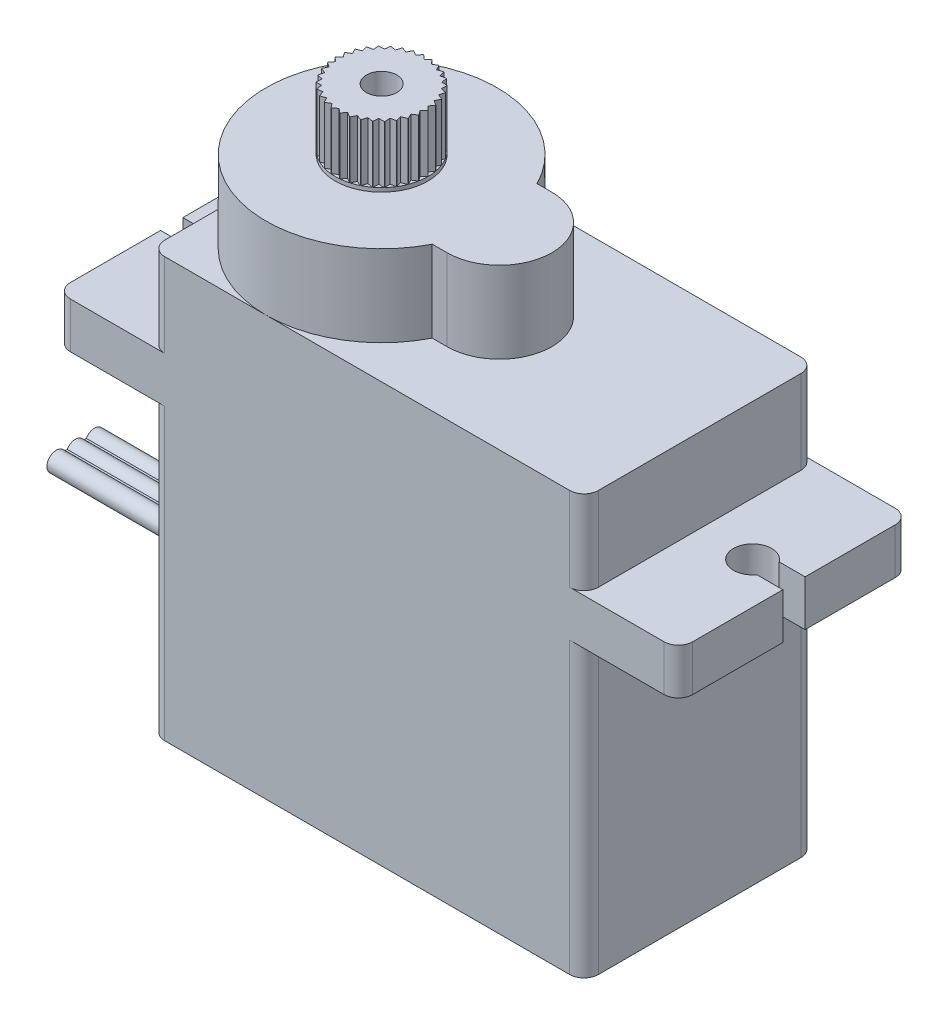
from build123d import *

# Parameters (mm, degrees)
BOSS_EXTRU_1_DEPTH      = 12.13
ENL_V_MAT_EXTRU_1_DEPTH = 38.395546526
CONG_1_R                = 0.75
BOSS_EXTRU_2_DEPTH      = 4.27
ESQUISSE4_R             = 2.43
BOSS_EXTRU_3_DEPTH      = 3.21
ENL_V_START             = -3
ESQUISSE5_R             = 0.8
ENL_V_MAT_EXTRU_2_DEPTH = 3
ESQUISSE6_W             = 17
ESQUISSE6_H             = 13
BOSS_EXTRU_4_DEPTH      = 0.01
ESQUISSE7_W             = 15.3
ESQUISSE7_H             = 10.8
ESQUISSE7_W_2           = 14.7
ESQUISSE7_H_2           = 3.6
ESQUISSE7_H_3           = 4
ESQUISSE7_H_4           = 2
BOSS_EXTRU_5_DEPTH      = 0.01
ESQUISSE8_W             = 13.9
ESQUISSE8_H             = 3.2
BOSS_EXTRU_6_DEPTH      = 0.01
BOSS_EXTRU_7_DEPTH      = 0.01
ESQUISSE10_W            = 0.138205128
ESQUISSE10_H            = 1.125384615
ENL_V_MAT_EXTRU_3_DEPTH = 0.01
BOSS_EXTRU_8_DEPTH      = 10


with BuildPart() as part:
    # Esquisse1 → Boss.-Extru.1 (new body)
    with BuildSketch(Plane.XY):
        Polygon((0, 0), (0, 15.2), (-4.95, 15.2), (-4.95, 17.6), (0, 17.6), (0, 22), (22.75, 22), (22.75, 17.6), (27.7, 17.6), (27.7, 15.2), (22.75, 15.2), (22.75, 0), align=None)
    extrude(amount=BOSS_EXTRU_1_DEPTH)

    # Esquisse2 → Enlèv. mat.-Extru.1 (cut, through all)
    with BuildSketch(Plane(origin=(0, 22, 0), x_dir=(1, 0, 0), z_dir=(0, 1, 0))):
        with BuildLine():
            Line((-4.95, -6.65), (-4.95, -5.48))
            Line((-4.95, -5.48), (-3.591033292, -5.48))
            ThreePointArc((-3.591033292, -5.48), (-1.78, -6.065), (-3.591033292, -6.65))
            Line((-3.591033292, -6.65), (-4.95, -6.65))
        make_face()
        with BuildLine():
            Line((27.7, -6.65), (26.341033292, -6.65))
            ThreePointArc((26.341033292, -6.65), (24.53, -6.065), (26.341033292, -5.48))
            Line((26.341033292, -5.48), (27.7, -5.48))
            Line((27.7, -5.48), (27.7, -6.65))
        make_face()
    extrude(amount=-ENL_V_MAT_EXTRU_1_DEPTH, mode=Mode.SUBTRACT)

    # Congé1
    cong_1_edges = [part.edges().sort_by_distance(p)[0] for p in [
        (27.7, 16.4, 0),
        (27.7, 16.4, 12.13),
        (-4.95, 16.4, 0),
        (-4.95, 16.4, 12.13),
        (22.75, 7.6, 12.13),
        (22.75, 19.8, 12.13),
        (0, 7.6, 12.13),
        (0, 19.8, 12.13),
        (0, 19.8, 0),
        (0, 7.6, 0),
        (22.75, 7.6, 0),
        (22.75, 19.8, 0),
    ]]
    fillet(cong_1_edges, radius=CONG_1_R)

    # Esquisse3 → Boss.-Extru.2 (add)
    with BuildSketch(Plane(origin=(0, 22, 0), x_dir=(1, 0, 0), z_dir=(0, 1, 0))):
        with BuildLine():
            Line((12.25, -3.315), (11.470712256, -3.315))
            ThreePointArc((11.470712256, -3.315), (0, -6.065), (11.470712256, -8.815))
            Line((11.470712256, -8.815), (12.25, -8.815))
            ThreePointArc((12.25, -8.815), (15, -6.065), (12.25, -3.315))
        make_face()
    extrude(amount=BOSS_EXTRU_2_DEPTH)

    # Esquisse4 → Boss.-Extru.3 (add)
    with BuildSketch(Plane(origin=(0, 26.27, 0), x_dir=(1, 0, 0), z_dir=(0, 1, 0))):
        with Locations((6.065, -6.065)):
            Circle(ESQUISSE4_R)
    extrude(amount=BOSS_EXTRU_3_DEPTH)

    # Esquisse5 → Enlèv. mat.-Extru.2 (cut)
    with BuildSketch(Plane(origin=(0, 29.48, 0), x_dir=(1, 0, 0), z_dir=(0, 1, 0)).offset(ENL_V_START)):
        with Locations((6.065, -6.065)):
            Circle(ESQUISSE5_R)
        with BuildLine():
            Line((5.85, -3.644530004), (6.065, -3.835))
            Line((6.065, -3.835), (6.28, -3.644530004))
            ThreePointArc((6.28, -3.644530004), (6.065, -3.635), (5.85, -3.644530004))
        make_face()
        with BuildLine():
            Line((6.298420978, -3.646236959), (6.474761425, -3.872969988))
            Line((6.474761425, -3.872969988), (6.721099411, -3.725249252))
            ThreePointArc((6.721099411, -3.725249252), (6.511511328, -3.676375368), (6.298420978, -3.646236959))
        make_face()
        with BuildLine():
            Line((6.738893085, -3.730311989), (6.870568916, -3.985586928))
            Line((6.870568916, -3.985586928), (7.139856144, -3.885645905))
            ThreePointArc((7.139856144, -3.885645905), (6.942817249, -3.799092483), (6.738893085, -3.730311989))
        make_face()
        with BuildLine():
            Line((7.156416571, -3.893892018), (7.238943723, -4.169015787))
            Line((7.238943723, -4.169015787), (7.522009939, -4.120257848))
            ThreePointArc((7.522009939, -4.120257848), (7.344230156, -3.99897236), (7.156416571, -3.893892018))
        make_face()
        with BuildLine():
            Line((7.536773174, -4.131406526), (7.567341285, -4.417010115))
            Line((7.567341285, -4.417010115), (7.854547009, -4.421095653))
            ThreePointArc((7.854547009, -4.421095653), (7.702080414, -4.269208331), (7.536773174, -4.131406526))
        make_face()
        with BuildLine():
            Line((7.867010308, -4.43476724), (7.844578417, -4.721124761))
            Line((7.844578417, -4.721124761), (8.126143201, -4.777914648))
            ThreePointArc((8.126143201, -4.777914648), (8.004181862, -4.600597834), (7.867010308, -4.43476724))
        make_face()
        with BuildLine():
            Line((8.135882141, -4.793643576), (8.06121414, -5.071003467))
            Line((8.06121414, -5.071003467), (8.327549634, -5.178563792))
            ThreePointArc((8.327549634, -5.178563792), (8.240246798, -4.981855795), (8.135882141, -4.793643576))
        make_face()
        with BuildLine():
            Line((8.334232568, -5.19581443), (8.209871184, -5.454731532))
            Line((8.209871184, -5.454731532), (8.451907653, -5.609399457))
            ThreePointArc((8.451907653, -5.609399457), (8.402236313, -5.399998934), (8.334232568, -5.19581443))
        make_face()
        with BuildLine():
            Line((8.455307, -5.627584356), (8.285487213, -5.859241558))
            Line((8.285487213, -5.859241558), (8.494982395, -6.055750052))
            ThreePointArc((8.494982395, -6.055750052), (8.484634048, -5.840787887), (8.455307, -5.627584356))
        make_face()
        with BuildLine():
            Line((8.494982395, -6.074249948), (8.285487213, -6.270758442))
            Line((8.285487213, -6.270758442), (8.455307, -6.502415644))
            ThreePointArc((8.455307, -6.502415644), (8.484634048, -6.289212113), (8.494982395, -6.074249948))
        make_face()
        with BuildLine():
            Line((8.451907653, -6.520600543), (8.209871184, -6.675268468))
            Line((8.209871184, -6.675268468), (8.334232568, -6.93418557))
            ThreePointArc((8.334232568, -6.93418557), (8.402236313, -6.730001066), (8.451907653, -6.520600543))
        make_face()
        with BuildLine():
            Line((8.327549634, -6.951436208), (8.06121414, -7.058996533))
            Line((8.06121414, -7.058996533), (8.135882141, -7.336356424))
            ThreePointArc((8.135882141, -7.336356424), (8.240246798, -7.148144205), (8.327549634, -6.951436208))
        make_face()
        with BuildLine():
            Line((8.126143201, -7.352085352), (7.844578417, -7.408875239))
            Line((7.844578417, -7.408875239), (7.867010308, -7.69523276))
            ThreePointArc((7.867010308, -7.69523276), (8.004181862, -7.529402166), (8.126143201, -7.352085352))
        make_face()
        with BuildLine():
            Line((7.854547009, -7.708904347), (7.567341285, -7.712989885))
            Line((7.567341285, -7.712989885), (7.536773174, -7.998593474))
            ThreePointArc((7.536773174, -7.998593474), (7.702080414, -7.860791669), (7.854547009, -7.708904347))
        make_face()
        with BuildLine():
            Line((7.522009939, -8.009742152), (7.238943723, -7.960984213))
            Line((7.238943723, -7.960984213), (7.156416571, -8.236107982))
            ThreePointArc((7.156416571, -8.236107982), (7.344230156, -8.13102764), (7.522009939, -8.009742152))
        make_face()
        with BuildLine():
            Line((7.139856144, -8.244354095), (6.870568916, -8.144413072))
            Line((6.870568916, -8.144413072), (6.738893085, -8.399688011))
            ThreePointArc((6.738893085, -8.399688011), (6.942817249, -8.330907517), (7.139856144, -8.244354095))
        make_face()
        with BuildLine():
            Line((6.721099411, -8.404750748), (6.474761425, -8.257030012))
            Line((6.474761425, -8.257030012), (6.298420978, -8.483763041))
            ThreePointArc((6.298420978, -8.483763041), (6.511511328, -8.453624632), (6.721099411, -8.404750748))
        make_face()
        with BuildLine():
            Line((6.28, -8.485469996), (6.065, -8.295))
            Line((6.065, -8.295), (5.85, -8.485469996))
            ThreePointArc((5.85, -8.485469996), (6.065, -8.495), (6.28, -8.485469996))
        make_face()
        with BuildLine():
            Line((5.831579022, -8.483763041), (5.655238575, -8.257030012))
            Line((5.655238575, -8.257030012), (5.408900589, -8.404750748))
            ThreePointArc((5.408900589, -8.404750748), (5.618488672, -8.453624632), (5.831579022, -8.483763041))
        make_face()
        with BuildLine():
            Line((5.391106915, -8.399688011), (5.259431084, -8.144413072))
            Line((5.259431084, -8.144413072), (4.990143856, -8.244354095))
            ThreePointArc((4.990143856, -8.244354095), (5.187182751, -8.330907517), (5.391106915, -8.399688011))
        make_face()
        with BuildLine():
            Line((4.973583429, -8.236107982), (4.891056277, -7.960984213))
            Line((4.891056277, -7.960984213), (4.607990061, -8.009742152))
            ThreePointArc((4.607990061, -8.009742152), (4.785769844, -8.13102764), (4.973583429, -8.236107982))
        make_face()
        with BuildLine():
            Line((4.593226826, -7.998593474), (4.562658715, -7.712989885))
            Line((4.562658715, -7.712989885), (4.275452991, -7.708904347))
            ThreePointArc((4.275452991, -7.708904347), (4.427919586, -7.860791669), (4.593226826, -7.998593474))
        make_face()
        with BuildLine():
            Line((4.262989692, -7.69523276), (4.285421583, -7.408875239))
            Line((4.285421583, -7.408875239), (4.003856799, -7.352085352))
            ThreePointArc((4.003856799, -7.352085352), (4.125818138, -7.529402166), (4.262989692, -7.69523276))
        make_face()
        with BuildLine():
            Line((3.994117859, -7.336356424), (4.06878586, -7.058996533))
            Line((4.06878586, -7.058996533), (3.802450366, -6.951436208))
            ThreePointArc((3.802450366, -6.951436208), (3.889753202, -7.148144205), (3.994117859, -7.336356424))
        make_face()
        with BuildLine():
            Line((3.795767432, -6.93418557), (3.920128816, -6.675268468))
            Line((3.920128816, -6.675268468), (3.678092347, -6.520600543))
            ThreePointArc((3.678092347, -6.520600543), (3.727763687, -6.730001066), (3.795767432, -6.93418557))
        make_face()
        with BuildLine():
            Line((3.674693, -6.502415644), (3.844512787, -6.270758442))
            Line((3.844512787, -6.270758442), (3.635017605, -6.074249948))
            ThreePointArc((3.635017605, -6.074249948), (3.645365952, -6.289212113), (3.674693, -6.502415644))
        make_face()
        with BuildLine():
            Line((3.635017605, -6.055750052), (3.844512787, -5.859241558))
            Line((3.844512787, -5.859241558), (3.674693, -5.627584356))
            ThreePointArc((3.674693, -5.627584356), (3.645365952, -5.840787887), (3.635017605, -6.055750052))
        make_face()
        with BuildLine():
            Line((3.678092347, -5.609399457), (3.920128816, -5.454731532))
            Line((3.920128816, -5.454731532), (3.795767432, -5.19581443))
            ThreePointArc((3.795767432, -5.19581443), (3.727763687, -5.399998934), (3.678092347, -5.609399457))
        make_face()
        with BuildLine():
            Line((3.802450366, -5.178563792), (4.06878586, -5.071003467))
            Line((4.06878586, -5.071003467), (3.994117859, -4.793643576))
            ThreePointArc((3.994117859, -4.793643576), (3.889753202, -4.981855795), (3.802450366, -5.178563792))
        make_face()
        with BuildLine():
            Line((4.003856799, -4.777914648), (4.285421583, -4.721124761))
            Line((4.285421583, -4.721124761), (4.262989692, -4.43476724))
            ThreePointArc((4.262989692, -4.43476724), (4.125818138, -4.600597834), (4.003856799, -4.777914648))
        make_face()
        with BuildLine():
            Line((4.275452991, -4.421095653), (4.562658715, -4.417010115))
            Line((4.562658715, -4.417010115), (4.593226826, -4.131406526))
            ThreePointArc((4.593226826, -4.131406526), (4.427919586, -4.269208331), (4.275452991, -4.421095653))
        make_face()
        with BuildLine():
            Line((4.607990061, -4.120257848), (4.891056277, -4.169015787))
            Line((4.891056277, -4.169015787), (4.973583429, -3.893892018))
            ThreePointArc((4.973583429, -3.893892018), (4.785769844, -3.99897236), (4.607990061, -4.120257848))
        make_face()
        with BuildLine():
            Line((4.990143856, -3.885645905), (5.259431084, -3.985586928))
            Line((5.259431084, -3.985586928), (5.391106915, -3.730311989))
            ThreePointArc((5.391106915, -3.730311989), (5.187182751, -3.799092483), (4.990143856, -3.885645905))
        make_face()
        with BuildLine():
            Line((5.408900589, -3.725249252), (5.655238575, -3.872969988))
            Line((5.655238575, -3.872969988), (5.831579022, -3.646236959))
            ThreePointArc((5.831579022, -3.646236959), (5.618488672, -3.676375368), (5.408900589, -3.725249252))
        make_face()
    extrude(amount=ENL_V_MAT_EXTRU_2_DEPTH, mode=Mode.SUBTRACT)

    # Esquisse6 → Boss.-Extru.4 (add)
    with BuildSketch(Plane(origin=(0, 0, 0), x_dir=(-1, 0, 0), z_dir=(0, 0, -1))):
        with Locations((-11.375, 10.5)):
            Rectangle(ESQUISSE6_W, ESQUISSE6_H)
    extrude(amount=BOSS_EXTRU_4_DEPTH)

    # Esquisse7 → Boss.-Extru.5 (add)
    with BuildSketch(Plane(origin=(0, 0, -0.01), x_dir=(-1, 0, 0), z_dir=(0, 0, -1))):
        with Locations((-11.375, 10.5)):
            Rectangle(ESQUISSE7_W, ESQUISSE7_H)
        with Locations((-11.375, 13.8)):
            Rectangle(ESQUISSE7_W_2, ESQUISSE7_H_2, mode=Mode.SUBTRACT)
        with Locations((-11.375, 9.7)):
            Rectangle(ESQUISSE7_W_2, ESQUISSE7_H_3, mode=Mode.SUBTRACT)
        with Locations((-11.375, 6.4)):
            Rectangle(ESQUISSE7_W_2, ESQUISSE7_H_4, mode=Mode.SUBTRACT)
    extrude(amount=BOSS_EXTRU_5_DEPTH)

    # Esquisse8 → Boss.-Extru.6 (add)
    with BuildSketch(Plane(origin=(0, 0, -0.01), x_dir=(-1, 0, 0), z_dir=(0, 0, -1))):
        with Locations((-11.375, 9.7)):
            Rectangle(ESQUISSE8_W, ESQUISSE8_H)
    extrude(amount=BOSS_EXTRU_6_DEPTH)

    # Esquisse9 → Boss.-Extru.7 (add)
    # profile 1 of 14: a face of its own
    with BuildSketch(Plane(origin=(0, 0, -0.01), x_dir=(-1, 0, 0), z_dir=(0, 0, -1))):
        with BuildLine():
            Line((-18.053708725, 12.253662611), (-18.053708725, 12.312062611))
            add(Edge.make_bspline(
                [(-18.053708725, 12.312062611), (-18.037731144, 12.312155243), (-18.007261095, 12.312331899), (-17.963756866, 12.315890591), (-17.924524652, 12.319994002), (-17.889511863, 12.326733501), (-17.859095614, 12.335951851), (-17.83256052, 12.346041291), (-17.810820155, 12.359042976), (-17.792577912, 12.373990923), (-17.777837818, 12.392872238), (-17.765746555, 12.415984738), (-17.755300138, 12.443726713), (-17.746701611, 12.476120877), (-17.740761676, 12.513297412), (-17.735472664, 12.554959334), (-17.733031903, 12.601448568), (-17.732688379, 12.634021555), (-17.732508725, 12.651056361)],
                knots=[0, 0, 0, 0, 1.363271351, 2.599826891, 3.723730404, 4.72933223, 5.636994449, 6.434888481, 7.145067108, 7.789958853, 8.436677121, 9.17432358, 10.008459227, 10.962554029, 12.029619826, 13.219506439, 14.545875824, 16, 16, 16, 16], degree=3))
            Line((-17.732508725, 12.651056361), (-17.732508725, 14.229225111))
            add(Edge.make_bspline(
                [(-17.732508725, 14.229225111), (-17.732725604, 14.239738761), (-17.7331108, 14.258411886), (-17.736629053, 14.282948827), (-17.741752292, 14.301225827), (-17.751833036, 14.314222595), (-17.768845369, 14.320532623), (-17.792574766, 14.3238077), (-17.825233318, 14.32656231), (-17.850065226, 14.326755121), (-17.863908725, 14.326862611)],
                knots=[0, 0, 0, 0, 1.250798897, 2.22152367, 2.948877087, 3.489162576, 4.105182813, 5.043085298, 6.35155464, 8, 8, 8, 8], degree=3))
            Line((-17.863908725, 14.326862611), (-17.916377475, 14.326862611))
            add(Edge.make_bspline(
                [(-17.916377475, 14.326862611), (-17.941931987, 14.326605602), (-17.991099526, 14.326111111), (-18.061625743, 14.322223938), (-18.125745403, 14.314941278), (-18.183374359, 14.305063161), (-18.234594769, 14.29259821), (-18.279332654, 14.27696918), (-18.318085349, 14.259232479), (-18.35051354, 14.237061489), (-18.378463146, 14.211144494), (-18.402457689, 14.180014838), (-18.424717079, 14.1443234), (-18.442948444, 14.10276668), (-18.459541789, 14.056639083), (-18.472837253, 14.005254649), (-18.484642874, 13.948994985), (-18.489290225, 13.909444721), (-18.491708725, 13.888862611)],
                knots=[0, 0, 0, 0, 1.470438357, 2.829161226, 4.062306352, 5.18164103, 6.191942072, 7.09144599, 7.905638181, 8.636246643, 9.342117641, 10.089719269, 10.891208183, 11.756693967, 12.695034711, 13.709722796, 14.808130903, 16, 16, 16, 16], degree=3))
            Line((-18.491708725, 13.888862611), (-18.550108725, 13.888862611))
            Line((-18.550108725, 13.888862611), (-18.533683725, 14.443662611))
            Line((-18.533683725, 14.443662611), (-16.564508725, 14.443662611))
            Line((-16.564508725, 14.443662611), (-16.564508725, 13.888862611))
            Line((-16.564508725, 13.888862611), (-16.622908725, 13.888862611))
            add(Edge.make_bspline(
                [(-16.622908725, 13.888862611), (-16.625238296, 13.909581951), (-16.629728149, 13.949514963), (-16.640304344, 14.006468883), (-16.652998704, 14.058302457), (-16.667775754, 14.104788304), (-16.685132836, 14.14599958), (-16.705113463, 14.181727907), (-16.727645512, 14.212391282), (-16.75342088, 14.238574486), (-16.785187039, 14.260453774), (-16.824548156, 14.278497025), (-16.87241495, 14.292918253), (-16.928288512, 14.305907066), (-16.992756891, 14.314787601), (-17.065468165, 14.322326742), (-17.146796433, 14.326116041), (-17.203864326, 14.326605581), (-17.233827475, 14.326862611)],
                knots=[0, 0, 0, 0, 1.141932975, 2.200881998, 3.170839561, 4.064045738, 4.870331341, 5.616474564, 6.301350606, 6.949406854, 7.619683779, 8.40237844, 9.31145344, 10.354351347, 11.542082747, 12.873517696, 14.358459537, 16, 16, 16, 16], degree=3))
            add(Edge.make_bspline(
                [(-17.233827475, 14.326862611), (-17.250249763, 14.326795208), (-17.279335518, 14.32667583), (-17.317429715, 14.323604018), (-17.344250952, 14.319366796), (-17.363069876, 14.312440365), (-17.37263946, 14.298356858), (-17.37796806, 14.280560735), (-17.381469659, 14.256877404), (-17.381879945, 14.239124387), (-17.382108725, 14.229225111)],
                knots=[0, 0, 0, 0, 1.820107384, 3.223618799, 4.218337293, 4.851501199, 5.356999914, 6.03373078, 6.903586869, 8, 8, 8, 8], degree=3))
            Line((-17.382108725, 14.229225111), (-17.382108725, 12.663375111))
            add(Edge.make_bspline(
                [(-17.382108725, 12.663375111), (-17.382027911, 12.644507304), (-17.381874621, 12.608718418), (-17.378225897, 12.557936533), (-17.374489284, 12.512684398), (-17.366719483, 12.473355326), (-17.358709273, 12.439335062), (-17.347637084, 12.411177878), (-17.335208049, 12.388343158), (-17.31976104, 12.370702904), (-17.300704029, 12.357553598), (-17.27830246, 12.346490891), (-17.252179952, 12.336138458), (-17.221657257, 12.329006519), (-17.187370406, 12.321773113), (-17.148734939, 12.317245899), (-17.106149335, 12.313337334), (-17.0764317, 12.312499994), (-17.060908725, 12.312062611)],
                knots=[0, 0, 0, 0, 1.576487009, 2.990316637, 4.255203723, 5.367190721, 6.338387147, 7.17167472, 7.889083929, 8.501372596, 9.111678671, 9.81095156, 10.587629953, 11.454003309, 12.426280643, 13.515806874, 14.70238431, 16, 16, 16, 16], degree=3))
            Line((-17.060908725, 12.312062611), (-17.059083725, 12.253662611))
            Line((-17.059083725, 12.253662611), (-18.053708725, 12.253662611))
        make_face()
    # profile 2 of 14: a face of its own
    with BuildSketch(Plane(origin=(0, 0, -0.01), x_dir=(-1, 0, 0), z_dir=(0, 0, -1))):
        with BuildLine():
            add(Edge.make_bspline(
                [(-15.718621225, 12.224462611), (-15.744819221, 12.224971401), (-15.796371018, 12.225972588), (-15.87164395, 12.236959812), (-15.943406334, 12.253607667), (-16.011340793, 12.277469162), (-16.075587179, 12.308214618), (-16.136136268, 12.345711028), (-16.192594597, 12.390583897), (-16.245232476, 12.441393678), (-16.292941184, 12.497536896), (-16.334212603, 12.5584209), (-16.369734252, 12.622830852), (-16.397835564, 12.691888683), (-16.420322946, 12.764524496), (-16.436179447, 12.841211816), (-16.445980457, 12.921813488), (-16.44712434, 12.976942275), (-16.447708725, 13.005106361)],
                knots=[0, 0, 0, 0, 1.047641924, 2.061524946, 3.037264393, 3.991956249, 4.936526894, 5.882253576, 6.835586605, 7.816909051, 8.805770048, 9.778068125, 10.755798395, 11.743591334, 12.756158384, 13.794585446, 14.873302178, 16, 16, 16, 16], degree=3))
            add(Edge.make_bspline(
                [(-16.447708725, 13.005106361), (-16.447154787, 13.033880145), (-16.446069729, 13.090242539), (-16.435818378, 13.17271357), (-16.418969427, 13.251036326), (-16.395643241, 13.325285785), (-16.366117859, 13.395502413), (-16.329147882, 13.461286432), (-16.285668536, 13.522987608), (-16.236069547, 13.580381974), (-16.181058691, 13.632237359), (-16.121666892, 13.677679022), (-16.05799223, 13.715713164), (-15.990767744, 13.747566764), (-15.919029226, 13.771610017), (-15.843423964, 13.789062896), (-15.763750083, 13.799003832), (-15.709370916, 13.800500212), (-15.681664975, 13.801262611)],
                knots=[0, 0, 0, 0, 1.111812729, 2.177830615, 3.206329527, 4.204736127, 5.181959956, 6.145203772, 7.115614133, 8.095010378, 9.07228725, 10.032872548, 10.979542411, 11.934155175, 12.902694134, 13.898050146, 14.929065986, 16, 16, 16, 16], degree=3))
            add(Edge.make_bspline(
                [(-15.681664975, 13.801262611), (-15.654862303, 13.800731937), (-15.602578941, 13.799696763), (-15.526241774, 13.78920404), (-15.454060926, 13.773071221), (-15.385806483, 13.750092077), (-15.321798804, 13.720485024), (-15.262024995, 13.683931906), (-15.20596082, 13.641557668), (-15.155062874, 13.592046597), (-15.109093559, 13.537449051), (-15.068632816, 13.478196911), (-15.034225209, 13.414503637), (-15.006414144, 13.346236146), (-14.985010285, 13.27359029), (-14.969534619, 13.196817578), (-14.960351875, 13.115589586), (-14.959133123, 13.060032316), (-14.958508725, 13.031568861)],
                knots=[0, 0, 0, 0, 1.079456535, 2.105671325, 3.098779657, 4.056149565, 5.002094203, 5.934361234, 6.874491235, 7.828008849, 8.78923515, 9.7462323, 10.714175167, 11.700871509, 12.711096386, 13.761545842, 14.853180856, 16, 16, 16, 16], degree=3))
            add(Edge.make_bspline(
                [(-14.958508725, 13.031568861), (-14.959109948, 13.001585435), (-14.960285099, 12.942979745), (-14.969795047, 12.857436116), (-14.986457614, 12.776794844), (-15.008494669, 12.700508148), (-15.037928814, 12.629042321), (-15.073623249, 12.562044938), (-15.115713196, 12.499712046), (-15.164062377, 12.442634692), (-15.218013803, 12.391727753), (-15.27598558, 12.346405601), (-15.339240439, 12.309035479), (-15.406459305, 12.27757037), (-15.478617406, 12.254244169), (-15.55471841, 12.236576979), (-15.635326384, 12.226720944), (-15.690460715, 12.225226113), (-15.718621225, 12.224462611)],
                knots=[0, 0, 0, 0, 1.149739572, 2.247284281, 3.295069331, 4.304574197, 5.288048377, 6.25350894, 7.211186257, 8.16710361, 9.116002241, 10.051632949, 10.982890334, 11.927567106, 12.892199273, 13.885448546, 14.919967891, 16, 16, 16, 16], degree=3))
        make_face()
        with BuildLine():
            add(Edge.make_bspline(
                [(-16.155708725, 13.111868861), (-16.155266572, 13.082807439), (-16.154404307, 13.026133336), (-16.147818215, 12.943290684), (-16.137701726, 12.864586409), (-16.122295451, 12.790204081), (-16.104151094, 12.719462718), (-16.08007365, 12.653507475), (-16.052903769, 12.591296708), (-16.020988582, 12.534211678), (-15.986250396, 12.482164817), (-15.948404478, 12.436791545), (-15.907966195, 12.398273816), (-15.86467752, 12.367130378), (-15.81938529, 12.34199985), (-15.771368306, 12.324514572), (-15.720878275, 12.314288863), (-15.686426289, 12.312813554), (-15.668889975, 12.312062611)],
                knots=[0, 0, 0, 0, 1.345865989, 2.624639201, 3.846992378, 5.018459434, 6.141022899, 7.226097035, 8.266728181, 9.282042853, 10.251073779, 11.161087336, 12.013179124, 12.830405216, 13.624755452, 14.40470216, 15.187981648, 16, 16, 16, 16], degree=3))
            add(Edge.make_bspline(
                [(-15.668889975, 12.312062611), (-15.651827834, 12.312457187), (-15.618623616, 12.313225062), (-15.570542803, 12.320426773), (-15.525474522, 12.330874453), (-15.484251366, 12.347152759), (-15.446267131, 12.367298282), (-15.411790658, 12.392216761), (-15.380512177, 12.421540383), (-15.353014968, 12.455791904), (-15.328774426, 12.494410457), (-15.307686557, 12.537696036), (-15.290171729, 12.585621829), (-15.275465742, 12.638082641), (-15.264299479, 12.695156763), (-15.256025438, 12.756849319), (-15.251737405, 12.823154247), (-15.250927014, 12.868834443), (-15.250508725, 12.892412611)],
                knots=[0, 0, 0, 0, 1.00311139, 1.952130723, 2.854891512, 3.718910365, 4.551551274, 5.378451593, 6.21397196, 7.066377065, 7.955061029, 8.891426771, 9.893619944, 10.953051258, 12.093630547, 13.312224586, 14.612685061, 16, 16, 16, 16], degree=3))
            add(Edge.make_bspline(
                [(-15.250508725, 12.892412611), (-15.250954026, 12.922537693), (-15.251823175, 12.98133645), (-15.258369259, 13.067223227), (-15.268533578, 13.148645818), (-15.28372158, 13.225409906), (-15.302607054, 13.297814124), (-15.32656806, 13.365583226), (-15.354137178, 13.429051613), (-15.386044309, 13.487549896), (-15.421412374, 13.540171858), (-15.459144424, 13.586790244), (-15.499941829, 13.625864347), (-15.543289219, 13.657882343), (-15.589356451, 13.682806536), (-15.638017931, 13.700741215), (-15.689256118, 13.711517682), (-15.724197369, 13.712941604), (-15.741889975, 13.713662611)],
                knots=[0, 0, 0, 0, 1.364931849, 2.664102079, 3.900968886, 5.080847917, 6.207501961, 7.288551281, 8.334637389, 9.340026029, 10.303343925, 11.204247645, 12.052365732, 12.855945321, 13.639142956, 14.417504958, 15.198698982, 16, 16, 16, 16], degree=3))
            add(Edge.make_bspline(
                [(-15.741889975, 13.713662611), (-15.757898097, 13.713345), (-15.789053101, 13.712726866), (-15.834296308, 13.704402745), (-15.876770389, 13.692339289), (-15.916793509, 13.675269377), (-15.953839533, 13.652707497), (-15.988174751, 13.625241106), (-16.019486716, 13.592699687), (-16.048208702, 13.555774763), (-16.073771448, 13.514162664), (-16.095435223, 13.468265993), (-16.114435514, 13.418788679), (-16.129031736, 13.365027681), (-16.141785963, 13.30757846), (-16.149466903, 13.245715605), (-16.154652813, 13.180091414), (-16.155350764, 13.134996721), (-16.155708725, 13.111868861)],
                knots=[0, 0, 0, 0, 0.93317157, 1.81613835, 2.675815679, 3.506921493, 4.347315273, 5.199951041, 6.066294406, 6.977244417, 7.925785969, 8.910485024, 9.935994432, 11.015160275, 12.159091197, 13.368131034, 14.650184923, 16, 16, 16, 16], degree=3))
        make_face(mode=Mode.SUBTRACT)
    # profile 3 of 14: a face of its own
    with BuildSketch(Plane(origin=(0, 0, -0.01), x_dir=(-1, 0, 0), z_dir=(0, 0, -1))):
        with BuildLine():
            Line((-14.228508725, 12.224462611), (-14.722171225, 13.503331361))
            add(Edge.make_bspline(
                [(-14.722171225, 13.503331361), (-14.728576183, 13.51904743), (-14.74052488, 13.548366363), (-14.759005109, 13.588195298), (-14.778553154, 13.619455282), (-14.796743268, 13.644357174), (-14.816605771, 13.662530106), (-14.838331341, 13.675254108), (-14.86227492, 13.683434394), (-14.879207899, 13.684116766), (-14.887789975, 13.684462611)],
                knots=[0, 0, 0, 0, 1.553824673, 2.898719995, 4.011374431, 4.924675533, 5.713163427, 6.455701943, 7.217309436, 8, 8, 8, 8], degree=3))
            Line((-14.887789975, 13.684462611), (-14.900108725, 13.684462611))
            Line((-14.900108725, 13.684462611), (-14.900108725, 13.742862611))
            Line((-14.900108725, 13.742862611), (-14.316564975, 13.742862611))
            Line((-14.316564975, 13.742862611), (-14.316564975, 13.684462611))
            Line((-14.316564975, 13.684462611), (-14.342114975, 13.684462611))
            add(Edge.make_bspline(
                [(-14.342114975, 13.684462611), (-14.350501314, 13.684282845), (-14.366054855, 13.683949448), (-14.387630575, 13.679464533), (-14.405340274, 13.671653193), (-14.41993874, 13.660946719), (-14.430243482, 13.645954656), (-14.436978533, 13.627129625), (-14.441524192, 13.604529376), (-14.441856679, 13.58791556), (-14.442033725, 13.579068861)],
                knots=[0, 0, 0, 0, 1.189498497, 2.206077154, 3.105068251, 3.921410406, 4.742309986, 5.644666648, 6.745807267, 8, 8, 8, 8], degree=3))
            add(Edge.make_bspline(
                [(-14.442033725, 13.579068861), (-14.4414351, 13.570381766), (-14.440101897, 13.551034637), (-14.433945948, 13.519644787), (-14.423006319, 13.483571517), (-14.414009404, 13.458124265), (-14.409183725, 13.444475111)],
                knots=[0, 0, 0, 0, 0.750652384, 1.671786761, 2.751215223, 4, 4, 4, 4], degree=3))
            Line((-14.409183725, 13.444475111), (-14.108058725, 12.671587611))
            Line((-14.108058725, 12.671587611), (-13.843433725, 13.303493861))
            Line((-13.843433725, 13.303493861), (-13.927383725, 13.518843861))
            add(Edge.make_bspline(
                [(-13.927383725, 13.518843861), (-13.933962655, 13.534628841), (-13.946067715, 13.563672797), (-13.966442687, 13.601987499), (-13.987000142, 13.631344215), (-14.009373167, 13.652377063), (-14.034866321, 13.665983559), (-14.064355647, 13.676219879), (-14.099484219, 13.682111296), (-14.124768694, 13.683648033), (-14.138171225, 13.684462611)],
                knots=[0, 0, 0, 0, 1.405184251, 2.585502582, 3.560701316, 4.339416602, 5.083755915, 5.91799241, 6.896391148, 8, 8, 8, 8], degree=3))
            Line((-14.138171225, 13.684462611), (-14.139996225, 13.742862611))
            Line((-14.139996225, 13.742862611), (-13.455164975, 13.742862611))
            Line((-13.455164975, 13.742862611), (-13.455164975, 13.684462611))
            Line((-13.455164975, 13.684462611), (-13.482083725, 13.684462611))
            add(Edge.make_bspline(
                [(-13.482083725, 13.684462611), (-13.494863821, 13.684053059), (-13.51869092, 13.683289494), (-13.552152771, 13.679297215), (-13.579943065, 13.670607908), (-13.603023714, 13.659307144), (-13.620404809, 13.64367637), (-13.633422007, 13.624761264), (-13.640741605, 13.601625011), (-13.641416288, 13.585050729), (-13.641771225, 13.576331361)],
                knots=[0, 0, 0, 0, 1.397510365, 2.605505863, 3.667251321, 4.566632091, 5.390532751, 6.192522202, 7.049125395, 8, 8, 8, 8], degree=3))
            add(Edge.make_bspline(
                [(-13.641771225, 13.576331361), (-13.641185306, 13.567187585), (-13.639906527, 13.547231146), (-13.633890337, 13.515832438), (-13.623643189, 13.482203207), (-13.615408425, 13.459344214), (-13.611202475, 13.447668861)],
                knots=[0, 0, 0, 0, 0.827141829, 1.805250533, 2.879019976, 4, 4, 4, 4], degree=3))
            Line((-13.611202475, 13.447668861), (-13.307339975, 12.698050111))
            Line((-13.307339975, 12.698050111), (-13.037696225, 13.397937611))
            add(Edge.make_bspline(
                [(-13.037696225, 13.397937611), (-13.029958652, 13.418983331), (-13.015658647, 13.457878462), (-13.002045627, 13.505578527), (-12.993384202, 13.53892232), (-12.989369753, 13.559963006), (-12.986869512, 13.578251179), (-12.986371247, 13.589404492), (-12.986139975, 13.594581361)],
                knots=[0, 0, 0, 0, 1.977350587, 3.654391993, 4.373512354, 5.015536724, 5.543056223, 6, 6, 6, 6], degree=3))
            add(Edge.make_bspline(
                [(-12.986139975, 13.594581361), (-12.986400292, 13.602382365), (-12.986889201, 13.617033663), (-12.992759206, 13.636983342), (-13.002588666, 13.653159543), (-13.01802086, 13.665165532), (-13.040159824, 13.673151309), (-13.070660842, 13.678441617), (-13.110423618, 13.683031371), (-13.140335164, 13.683954931), (-13.156777475, 13.684462611)],
                knots=[0, 0, 0, 0, 0.843736179, 1.584646067, 2.229780951, 2.863428836, 3.662796026, 4.756084668, 6.216826959, 8, 8, 8, 8], degree=3))
            Line((-13.156777475, 13.684462611), (-13.158602475, 13.742862611))
            Line((-13.158602475, 13.742862611), (-12.710108725, 13.742862611))
            Line((-12.710108725, 13.742862611), (-12.710108725, 13.684462611))
            add(Edge.make_bspline(
                [(-12.710108725, 13.684462611), (-12.718070085, 13.682870069), (-12.73392684, 13.679698181), (-12.75686253, 13.670752806), (-12.776874774, 13.655773514), (-12.796889973, 13.63731668), (-12.815635422, 13.610339412), (-12.834594552, 13.57401758), (-12.856223937, 13.527629581), (-12.870002988, 13.49277293), (-12.877552475, 13.473675111)],
                knots=[0, 0, 0, 0, 0.687430283, 1.369164703, 2.062483404, 2.791385722, 3.66740676, 4.826005169, 6.260980907, 8, 8, 8, 8], degree=3))
            Line((-12.877552475, 13.473675111), (-13.352508725, 12.224462611))
            Line((-13.352508725, 12.224462611), (-13.410908725, 12.224462611))
            Line((-13.410908725, 12.224462611), (-13.781383725, 13.151562611))
            Line((-13.781383725, 13.151562611), (-14.170108725, 12.224462611))
            Line((-14.170108725, 12.224462611), (-14.228508725, 12.224462611))
        make_face()
    # profile 4 of 14: a face of its own
    with BuildSketch(Plane(origin=(0, 0, -0.01), x_dir=(-1, 0, 0), z_dir=(0, 0, -1))):
        with BuildLine():
            Line((-11.284327475, 12.837662611), (-11.220908725, 12.803443861))
            add(Edge.make_bspline(
                [(-11.220908725, 12.803443861), (-11.231736773, 12.779583968), (-11.252886244, 12.732980543), (-11.288463878, 12.666970354), (-11.324137399, 12.605132064), (-11.361905638, 12.548368118), (-11.400344647, 12.495812051), (-11.440715611, 12.44821399), (-11.482099103, 12.405134402), (-11.52520004, 12.367072251), (-11.569693011, 12.333670577), (-11.615385224, 12.304142081), (-11.663054266, 12.279422085), (-11.712530901, 12.259255953), (-11.763712176, 12.24371576), (-11.816572037, 12.23289983), (-11.870868485, 12.225718471), (-11.907694062, 12.224883715), (-11.926271225, 12.224462611)],
                knots=[0, 0, 0, 0, 1.295332901, 2.530059579, 3.706420818, 4.824455709, 5.89994447, 6.924529971, 7.908480006, 8.851573062, 9.764589289, 10.657498217, 11.538802981, 12.415861708, 13.29613901, 14.179655171, 15.08170234, 16, 16, 16, 16], degree=3))
            add(Edge.make_bspline(
                [(-11.926271225, 12.224462611), (-11.949278984, 12.225001887), (-11.994609165, 12.226064375), (-12.060719764, 12.236653018), (-12.123816105, 12.252152701), (-12.183153135, 12.275551908), (-12.23965329, 12.304513194), (-12.292174344, 12.341147466), (-12.341983985, 12.383332426), (-12.387786838, 12.432073721), (-12.428997359, 12.48617167), (-12.465366344, 12.544454034), (-12.495946132, 12.606857749), (-12.52126015, 12.673233772), (-12.540010967, 12.743825783), (-12.554435949, 12.818008411), (-12.562582088, 12.896336081), (-12.563592047, 12.949881966), (-12.564108725, 12.977275111)],
                knots=[0, 0, 0, 0, 0.996360144, 1.963041525, 2.895056925, 3.806974437, 4.720890728, 5.640517495, 6.575650868, 7.545495563, 8.532920347, 9.518759895, 10.518059, 11.540247015, 12.59238562, 13.679555995, 14.812901134, 16, 16, 16, 16], degree=3))
            add(Edge.make_bspline(
                [(-12.564108725, 12.977275111), (-12.563431697, 13.00740445), (-12.562108963, 13.066269219), (-12.553654015, 13.152381294), (-12.538261989, 13.233871351), (-12.518325011, 13.311241636), (-12.490829645, 13.383658699), (-12.458767445, 13.452169799), (-12.419607171, 13.515629617), (-12.375478813, 13.574588041), (-12.326508657, 13.627745418), (-12.27334692, 13.674476439), (-12.215771784, 13.71305329), (-12.155507637, 13.746153646), (-12.090891184, 13.770601597), (-12.023043339, 13.788556532), (-11.951392051, 13.799142617), (-11.902429019, 13.800546484), (-11.877452475, 13.801262611)],
                knots=[0, 0, 0, 0, 1.200700751, 2.345852059, 3.442977925, 4.502865246, 5.524983923, 6.525255318, 7.512666179, 8.490808881, 9.455777151, 10.387910809, 11.304007801, 12.212354341, 13.12173136, 14.049283122, 15.004919309, 16, 16, 16, 16], degree=3))
            add(Edge.make_bspline(
                [(-11.877452475, 13.801262611), (-11.857202776, 13.800880072), (-11.817628751, 13.800132475), (-11.759722444, 13.792654233), (-11.704919653, 13.780338422), (-11.652974346, 13.763571725), (-11.604201537, 13.741447712), (-11.558542069, 13.714434217), (-11.515672212, 13.682841144), (-11.476634699, 13.646026482), (-11.440293252, 13.605692678), (-11.409043684, 13.560633855), (-11.381390087, 13.512467151), (-11.35805387, 13.460506262), (-11.338946575, 13.404924283), (-11.324432143, 13.345493731), (-11.313874236, 13.282652854), (-11.310321161, 13.239351029), (-11.308508725, 13.217262611)],
                knots=[0, 0, 0, 0, 1.065274194, 2.081867376, 3.066350322, 4.01804376, 4.949392687, 5.87871024, 6.805577358, 7.745689537, 8.698190407, 9.657493625, 10.625439389, 11.6177326, 12.650456243, 13.714256049, 14.834033671, 16, 16, 16, 16], degree=3))
            Line((-11.308508725, 13.217262611), (-12.330508725, 13.217262611))
            Line((-12.330508725, 13.217262611), (-12.330508725, 13.183500111))
            add(Edge.make_bspline(
                [(-12.330508725, 13.183500111), (-12.330099065, 13.157628729), (-12.329299921, 13.107160152), (-12.322266177, 13.033546645), (-12.311243658, 12.963888882), (-12.294425583, 12.89845633), (-12.274358451, 12.836499922), (-12.248457591, 12.77900322), (-12.218963874, 12.725031191), (-12.1842081, 12.676037346), (-12.146100646, 12.631602793), (-12.104367059, 12.593149101), (-12.059834749, 12.560243497), (-12.011970973, 12.533893797), (-11.961537321, 12.512345549), (-11.907558367, 12.498185493), (-11.850883742, 12.488495116), (-11.811947257, 12.487678275), (-11.792133725, 12.487262611)],
                knots=[0, 0, 0, 0, 1.25568754, 2.449531398, 3.586856485, 4.675597558, 5.726245985, 6.74427183, 7.732463494, 8.707493859, 9.654877254, 10.569232813, 11.456754195, 12.335944755, 13.216250646, 14.111812359, 15.039161662, 16, 16, 16, 16], degree=3))
            add(Edge.make_bspline(
                [(-11.792133725, 12.487262611), (-11.767242392, 12.488257871), (-11.718116939, 12.490222114), (-11.646364895, 12.507674913), (-11.577519766, 12.534522176), (-11.512226769, 12.573621361), (-11.450247881, 12.623807398), (-11.390809205, 12.684241812), (-11.334818666, 12.756347173), (-11.301625587, 12.809804216), (-11.284327475, 12.837662611)],
                knots=[0, 0, 0, 0, 0.921104785, 1.817889367, 2.721044028, 3.650848792, 4.625172788, 5.669283745, 6.785379615, 8, 8, 8, 8], degree=3))
        make_face()
        with BuildLine():
            Line((-12.319558725, 13.304862611), (-11.688108725, 13.304862611))
            add(Edge.make_bspline(
                [(-11.688108725, 13.304862611), (-11.678844191, 13.305124513), (-11.662268191, 13.305593106), (-11.640231117, 13.306747298), (-11.624618776, 13.310443764), (-11.612988874, 13.31465583), (-11.607117373, 13.323648599), (-11.60302348, 13.334307569), (-11.601059993, 13.348301641), (-11.600704155, 13.35854781), (-11.600508725, 13.364175111)],
                knots=[0, 0, 0, 0, 1.746581535, 3.124963933, 4.124516505, 4.790133434, 5.362475572, 6.069265974, 6.939621302, 8, 8, 8, 8], degree=3))
            add(Edge.make_bspline(
                [(-11.600508725, 13.364175111), (-11.600717792, 13.376509834), (-11.601127134, 13.400660528), (-11.605910647, 13.435913569), (-11.613216356, 13.469487628), (-11.623184768, 13.50166452), (-11.636454634, 13.53219562), (-11.652628149, 13.561137401), (-11.671256144, 13.588725728), (-11.69318324, 13.61409354), (-11.717283699, 13.637151117), (-11.742624566, 13.657934046), (-11.770075349, 13.674896971), (-11.798854187, 13.689213672), (-11.829510909, 13.700142693), (-11.861666145, 13.707700806), (-11.895212205, 13.713187087), (-11.918187387, 13.713501854), (-11.929921225, 13.713662611)],
                knots=[0, 0, 0, 0, 1.10125256, 2.156190443, 3.171540588, 4.168452469, 5.160352378, 6.139515885, 7.126845877, 8.128928881, 9.128244968, 10.104292968, 11.050475913, 12.004430511, 12.971358143, 13.95005024, 14.953053853, 16, 16, 16, 16], degree=3))
            add(Edge.make_bspline(
                [(-11.929921225, 13.713662611), (-11.943322396, 13.71330271), (-11.969460676, 13.712600743), (-12.007625581, 13.707395385), (-12.043940057, 13.699380586), (-12.078273444, 13.687343845), (-12.110837716, 13.672241769), (-12.141709457, 13.653923435), (-12.170400586, 13.631945081), (-12.197054351, 13.606738722), (-12.220968606, 13.578321971), (-12.243347596, 13.547677077), (-12.262119229, 13.51371022), (-12.279381615, 13.477467764), (-12.293380136, 13.438138335), (-12.304533671, 13.396110938), (-12.314020046, 13.351539577), (-12.317677251, 13.320718644), (-12.319558725, 13.304862611)],
                knots=[0, 0, 0, 0, 1.025265774, 1.999727101, 2.942751576, 3.866620457, 4.777866879, 5.686060791, 6.607874671, 7.538172576, 8.487496358, 9.446756515, 10.437074993, 11.452383272, 12.516356745, 13.625949598, 14.778654039, 16, 16, 16, 16], degree=3))
        make_face(mode=Mode.SUBTRACT)
    # profile 5 of 14: a face of its own
    with BuildSketch(Plane(origin=(0, 0, -0.01), x_dir=(-1, 0, 0), z_dir=(0, 0, -1))):
        with BuildLine():
            Line((-11.074908725, 12.253662611), (-11.074908725, 12.312062611))
            add(Edge.make_bspline(
                [(-11.074908725, 12.312062611), (-11.062730284, 12.313008615), (-11.039227661, 12.314834267), (-11.0055644, 12.319372236), (-10.974912149, 12.325200877), (-10.947451548, 12.332462307), (-10.922875516, 12.341003976), (-10.901613034, 12.35155324), (-10.882816454, 12.362941607), (-10.861596037, 12.380939338), (-10.84032085, 12.411324497), (-10.823401163, 12.457390581), (-10.814050846, 12.514266934), (-10.812790468, 12.555664344), (-10.812108725, 12.578056361)],
                knots=[0, 0, 0, 0, 1.010875112, 1.950842311, 2.809956828, 3.591620321, 4.300350534, 4.959020768, 5.552788132, 6.115311215, 7.250871405, 8.573972865, 10.146848901, 12, 12, 12, 12], degree=3))
            Line((-10.812108725, 12.578056361), (-10.812108725, 13.356418861))
            add(Edge.make_bspline(
                [(-10.812108725, 13.356418861), (-10.812148474, 13.368588409), (-10.812224051, 13.391726582), (-10.814073946, 13.424764233), (-10.817072024, 13.45434407), (-10.821749726, 13.480512116), (-10.827026757, 13.503470183), (-10.833642996, 13.52319327), (-10.841982222, 13.539354565), (-10.854285658, 13.557303843), (-10.877775647, 13.574228485), (-10.913648344, 13.587913146), (-10.959469163, 13.59566325), (-10.993058925, 13.596437675), (-11.011489975, 13.596862611)],
                knots=[0, 0, 0, 0, 1.173261413, 2.230742347, 3.18945428, 4.038103952, 4.792156478, 5.460000819, 6.037161295, 6.54176069, 7.544975189, 8.762227156, 10.223400559, 12, 12, 12, 12], degree=3))
            Line((-11.011489975, 13.596862611), (-11.065327475, 13.596862611))
            Line((-11.065327475, 13.596862611), (-11.065327475, 13.655262611))
            add(Edge.make_bspline(
                [(-11.065327475, 13.655262611), (-11.035340815, 13.663073857), (-10.977717636, 13.67808416), (-10.895161242, 13.701247093), (-10.819327733, 13.722042054), (-10.749973891, 13.741808421), (-10.686065673, 13.760569767), (-10.626966627, 13.778875298), (-10.571972424, 13.796090678), (-10.536970593, 13.807894809), (-10.520108725, 13.813581361)],
                knots=[0, 0, 0, 0, 1.309643145, 2.516645804, 3.62386683, 4.633048552, 5.564566531, 6.438838951, 7.247922427, 8, 8, 8, 8], degree=3))
            Line((-10.520108725, 13.813581361), (-10.520108725, 13.508350111))
            add(Edge.make_bspline(
                [(-10.520108725, 13.508350111), (-10.502765088, 13.531702741), (-10.469729013, 13.576184717), (-10.418093024, 13.635838685), (-10.368816011, 13.686579453), (-10.321285825, 13.728092941), (-10.275171063, 13.760937131), (-10.229496921, 13.783382806), (-10.185242936, 13.798405573), (-10.155670849, 13.80033358), (-10.141421225, 13.801262611)],
                knots=[0, 0, 0, 0, 1.41194792, 2.689471553, 3.827820359, 4.843438003, 5.750879087, 6.566580275, 7.309291512, 8, 8, 8, 8], degree=3))
            add(Edge.make_bspline(
                [(-10.141421225, 13.801262611), (-10.129054602, 13.800614465), (-10.1052142, 13.799364969), (-10.071067583, 13.7907319), (-10.040716009, 13.775205055), (-10.014540823, 13.754131753), (-9.992166018, 13.729213008), (-9.976582337, 13.699906925), (-9.967075924, 13.667555454), (-9.965909551, 13.644987767), (-9.965308725, 13.633362611)],
                knots=[0, 0, 0, 0, 1.090552196, 2.102368936, 3.080183501, 4.073153223, 5.05234687, 6.012615324, 6.976250526, 8, 8, 8, 8], degree=3))
            add(Edge.make_bspline(
                [(-9.965308725, 13.633362611), (-9.96581707, 13.622398452), (-9.966792301, 13.601364325), (-9.972229515, 13.571160981), (-9.983722521, 13.544884709), (-9.997980153, 13.521736102), (-10.016496131, 13.503288144), (-10.037877251, 13.489575657), (-10.062410645, 13.481606605), (-10.079618264, 13.480588093), (-10.088496225, 13.480062611)],
                knots=[0, 0, 0, 0, 1.193848595, 2.290332094, 3.313360737, 4.295312205, 5.231034685, 6.130527578, 7.035479345, 8, 8, 8, 8], degree=3))
            add(Edge.make_bspline(
                [(-10.088496225, 13.480062611), (-10.097871986, 13.480653038), (-10.117488824, 13.481888385), (-10.146600207, 13.493746039), (-10.177073719, 13.51071627), (-10.20656483, 13.533875745), (-10.233643935, 13.557294819), (-10.258301929, 13.57415259), (-10.277430126, 13.586285017), (-10.289764904, 13.588297651), (-10.294721225, 13.589106361)],
                knots=[0, 0, 0, 0, 0.943605596, 1.974299147, 3.137105988, 4.464912331, 5.753817646, 6.747171659, 7.496592486, 8, 8, 8, 8], degree=3))
            add(Edge.make_bspline(
                [(-10.294721225, 13.589106361), (-10.302868766, 13.588446309), (-10.319846519, 13.587070901), (-10.345157112, 13.576454728), (-10.370659552, 13.55982365), (-10.396588945, 13.535972666), (-10.424254972, 13.505202531), (-10.454098709, 13.466336561), (-10.486368571, 13.418985206), (-10.508348395, 13.384468379), (-10.520108725, 13.366000111)],
                knots=[0, 0, 0, 0, 0.594895557, 1.23963655, 1.980451075, 2.815852296, 3.808412824, 5.005932462, 6.398020764, 8, 8, 8, 8], degree=3))
            Line((-10.520108725, 13.366000111), (-10.520108725, 12.547943861))
            add(Edge.make_bspline(
                [(-10.520108725, 12.547943861), (-10.519693337, 12.527350243), (-10.518930231, 12.489517882), (-10.508796609, 12.438130384), (-10.493850239, 12.396537571), (-10.473448721, 12.370029112), (-10.453004213, 12.355022724), (-10.434733974, 12.345106567), (-10.41312153, 12.336485609), (-10.388296555, 12.329401976), (-10.360320337, 12.322881086), (-10.328897302, 12.318040043), (-10.294164438, 12.31449722), (-10.269937787, 12.31289686), (-10.257308725, 12.312062611)],
                knots=[0, 0, 0, 0, 1.786074172, 3.281181849, 4.532462394, 5.595139331, 6.123636508, 6.726795126, 7.396601447, 8.140732227, 8.967644554, 9.890814309, 10.900506746, 12, 12, 12, 12], degree=3))
            Line((-10.257308725, 12.312062611), (-10.257308725, 12.253662611))
            Line((-10.257308725, 12.253662611), (-11.074908725, 12.253662611))
        make_face()
    # profile 6 of 14: a face of its own
    with BuildSketch(Plane(origin=(0, 0, -0.01), x_dir=(-1, 0, 0), z_dir=(0, 0, -1))):
        with BuildLine():
            Line((-9.060108725, 12.253662611), (-9.060108725, 12.312062611))
            add(Edge.make_bspline(
                [(-9.060108725, 12.312062611), (-9.044438504, 12.312188179), (-9.014430408, 12.312428638), (-8.971453817, 12.31559353), (-8.932741681, 12.320969038), (-8.898133092, 12.328312256), (-8.867568324, 12.33708546), (-8.841155346, 12.348336308), (-8.819409075, 12.362379672), (-8.800615373, 12.37813871), (-8.785667721, 12.398424968), (-8.772951059, 12.422733983), (-8.76275887, 12.452054626), (-8.753507368, 12.48582108), (-8.746852712, 12.524787018), (-8.742710025, 12.568713712), (-8.739195151, 12.617391572), (-8.739006939, 12.651505078), (-8.738908725, 12.669306361)],
                knots=[0, 0, 0, 0, 1.305059997, 2.499158384, 3.58662435, 4.558111332, 5.443882244, 6.232363192, 6.938716132, 7.594160115, 8.263054854, 9.02240137, 9.872014315, 10.843088233, 11.936514574, 13.159232095, 14.517616065, 16, 16, 16, 16], degree=3))
            Line((-8.738908725, 12.669306361), (-8.738908725, 14.098281361))
            add(Edge.make_bspline(
                [(-8.738908725, 14.098281361), (-8.73900325, 14.112434905), (-8.739183429, 14.139413643), (-8.742700748, 14.177752556), (-8.746879211, 14.212283717), (-8.75362584, 14.243047726), (-8.76269105, 14.269732905), (-8.773092612, 14.292846706), (-8.786007633, 14.311724214), (-8.80106323, 14.327638341), (-8.819717893, 14.339942096), (-8.841446968, 14.351234112), (-8.86791218, 14.359869251), (-8.898130183, 14.368234304), (-8.932862399, 14.374236493), (-8.971455113, 14.379938548), (-9.014437016, 14.383339474), (-9.044440057, 14.384602837), (-9.060108725, 14.385262611)],
                knots=[0, 0, 0, 0, 1.325012739, 2.525669147, 3.603435068, 4.581418486, 5.468796211, 6.239824854, 6.947029596, 7.601796094, 8.277455708, 9.029163932, 9.889609959, 10.877809466, 11.964574111, 13.187333426, 14.531124356, 16, 16, 16, 16], degree=3))
            Line((-9.060108725, 14.385262611), (-9.060108725, 14.443662611))
            Line((-9.060108725, 14.443662611), (-8.091489975, 14.443662611))
            add(Edge.make_bspline(
                [(-8.091489975, 14.443662611), (-8.060451416, 14.443255399), (-8.000271518, 14.442465865), (-7.912823485, 14.435512684), (-7.831112987, 14.424333763), (-7.754981351, 14.408462087), (-7.684697144, 14.38792377), (-7.619801518, 14.363606696), (-7.561046087, 14.333684924), (-7.507928743, 14.299503887), (-7.460611932, 14.26112651), (-7.419380715, 14.218414569), (-7.385304812, 14.170956622), (-7.356235984, 14.120024465), (-7.335401656, 14.064211922), (-7.318840732, 14.004959137), (-7.31000869, 13.941138736), (-7.308753261, 13.897250862), (-7.308108725, 13.874718861)],
                knots=[0, 0, 0, 0, 1.356219774, 2.629541143, 3.830747096, 4.958262378, 6.024569241, 7.028048376, 7.982157297, 8.900215178, 9.783551966, 10.639073118, 11.485875884, 12.330877134, 13.193596307, 14.081944374, 15.015271662, 16, 16, 16, 16], degree=3))
            add(Edge.make_bspline(
                [(-7.308108725, 13.874718861), (-7.309229103, 13.843460236), (-7.31141702, 13.782417183), (-7.329087956, 13.693820982), (-7.358516415, 13.611307509), (-7.399073009, 13.535340511), (-7.450235135, 13.467592543), (-7.510953737, 13.409392264), (-7.580332011, 13.360285346), (-7.632487508, 13.33744522), (-7.658964975, 13.325850111)],
                knots=[0, 0, 0, 0, 1.080750432, 2.110531274, 3.110706554, 4.101706231, 5.078228327, 6.034542011, 7.002207808, 8, 8, 8, 8], degree=3))
            add(Edge.make_bspline(
                [(-7.658964975, 13.325850111), (-7.67743177, 13.319045128), (-7.715018197, 13.305194593), (-7.774577407, 13.288943205), (-7.837660818, 13.275417115), (-7.893188854, 13.266371873), (-7.940848621, 13.260181884), (-7.980900523, 13.256778819), (-8.024853675, 13.253566938), (-8.072605139, 13.250743383), (-8.124181332, 13.249108519), (-8.179388379, 13.247712526), (-8.238399773, 13.24680463), (-8.279008432, 13.246579147), (-8.299996225, 13.246462611)],
                knots=[0, 0, 0, 0, 1.090085807, 2.218708254, 3.417034563, 4.663891137, 5.3349377, 6.079573105, 6.890714362, 7.776994417, 8.729843556, 9.749825754, 10.837041364, 12, 12, 12, 12], degree=3))
            Line((-8.299996225, 13.246462611), (-8.332389975, 13.246462611))
            add(Edge.make_bspline(
                [(-8.332389975, 13.246462611), (-8.338017737, 13.24642013), (-8.34824725, 13.246342913), (-8.36183351, 13.244796478), (-8.37197172, 13.241703141), (-8.37949931, 13.236953996), (-8.383231109, 13.22863954), (-8.385691757, 13.217847522), (-8.388096697, 13.20335605), (-8.388362028, 13.192332409), (-8.388508725, 13.186237611)],
                knots=[0, 0, 0, 0, 1.347001636, 2.448428276, 3.25400309, 3.880117494, 4.498784223, 5.363816004, 6.542495106, 8, 8, 8, 8], degree=3))
            Line((-8.388508725, 13.186237611), (-8.388508725, 12.669306361))
            add(Edge.make_bspline(
                [(-8.388508725, 12.669306361), (-8.388330619, 12.651359262), (-8.387990781, 12.617114875), (-8.385537422, 12.568195778), (-8.38024862, 12.524412307), (-8.374417965, 12.485380596), (-8.365512257, 12.451634175), (-8.355930954, 12.422415155), (-8.343567417, 12.398440517), (-8.329080189, 12.378605409), (-8.31066872, 12.363166386), (-8.288959763, 12.349678185), (-8.262402167, 12.339133335), (-8.231993266, 12.329420742), (-8.196931614, 12.322400437), (-8.157622988, 12.317003025), (-8.113905899, 12.313405204), (-8.083284224, 12.312522909), (-8.067308725, 12.312062611)],
                knots=[0, 0, 0, 0, 1.493169556, 2.849077631, 4.071632689, 5.161556055, 6.128184551, 6.972473481, 7.713786538, 8.364112593, 9.000882223, 9.699620713, 10.482113724, 11.370472111, 12.353114317, 13.451741703, 14.670559355, 16, 16, 16, 16], degree=3))
            Line((-8.067308725, 12.312062611), (-8.067308725, 12.253662611))
            Line((-8.067308725, 12.253662611), (-9.060108725, 12.253662611))
        make_face()
        with BuildLine():
            add(Edge.make_bspline(
                [(-8.388508725, 13.467287611), (-8.38840908, 13.457967906), (-8.388224313, 13.440686757), (-8.382891622, 13.417438384), (-8.376217674, 13.398145481), (-8.364260331, 13.383678115), (-8.34754705, 13.373775295), (-8.325718955, 13.367918594), (-8.298631356, 13.363799822), (-8.278573703, 13.363452558), (-8.267602475, 13.363262611)],
                knots=[0, 0, 0, 0, 1.180848591, 2.189599317, 3.022568215, 3.750389454, 4.523056265, 5.45273675, 6.606686128, 8, 8, 8, 8], degree=3))
            add(Edge.make_bspline(
                [(-8.267602475, 13.363262611), (-8.244624994, 13.36355706), (-8.200108277, 13.364127528), (-8.135446999, 13.370109626), (-8.075097964, 13.380167555), (-8.018680196, 13.393620862), (-7.966626227, 13.411428398), (-7.918661187, 13.432866118), (-7.875010185, 13.458528623), (-7.835656131, 13.488222224), (-7.800668393, 13.521714912), (-7.770490178, 13.558903336), (-7.744532082, 13.599504649), (-7.723583946, 13.643823605), (-7.707686351, 13.692010049), (-7.695772075, 13.743437341), (-7.688952512, 13.79864639), (-7.688131196, 13.836527304), (-7.687708725, 13.856012611)],
                knots=[0, 0, 0, 0, 1.270680227, 2.461824013, 3.587544432, 4.652570444, 5.666121054, 6.626175508, 7.55384152, 8.460677517, 9.347152088, 10.226090928, 11.103539049, 12.006621635, 12.929699377, 13.905109827, 14.922423632, 16, 16, 16, 16], degree=3))
            add(Edge.make_bspline(
                [(-7.687708725, 13.856012611), (-7.687946723, 13.874893766), (-7.688408864, 13.911556862), (-7.695188064, 13.964617577), (-7.704933033, 14.014166691), (-7.719066829, 14.060302456), (-7.737759477, 14.102630159), (-7.760369905, 14.141536847), (-7.786895859, 14.176878077), (-7.817714969, 14.208607004), (-7.852627101, 14.236448306), (-7.891293596, 14.260876929), (-7.934049375, 14.281360155), (-7.980633511, 14.298300199), (-8.03133052, 14.310765391), (-8.085693091, 14.320543918), (-8.144309217, 14.325853234), (-8.184707281, 14.326519052), (-8.205552475, 14.326862611)],
                knots=[0, 0, 0, 0, 1.130531418, 2.195246113, 3.199601701, 4.153627673, 5.079786071, 5.965945378, 6.844387348, 7.720794625, 8.608826036, 9.513899128, 10.455352267, 11.444084473, 12.478417678, 13.579554487, 14.751062493, 16, 16, 16, 16], degree=3))
            add(Edge.make_bspline(
                [(-8.205552475, 14.326862611), (-8.222001311, 14.326474753), (-8.252157207, 14.325763688), (-8.293193429, 14.319635285), (-8.326007197, 14.309720605), (-8.3519943, 14.294093694), (-8.369575838, 14.268746375), (-8.380650836, 14.234731887), (-8.387696838, 14.190879716), (-8.388220381, 14.158235375), (-8.388508725, 14.140256361)],
                knots=[0, 0, 0, 0, 1.26370789, 2.316774373, 3.178001972, 3.888022983, 4.598717137, 5.493477682, 6.619521794, 8, 8, 8, 8], degree=3))
            Line((-8.388508725, 14.140256361), (-8.388508725, 13.467287611))
        make_face(mode=Mode.SUBTRACT)
    # profile 7 of 14: a face of its own
    with BuildSketch(Plane(origin=(0, 0, -0.01), x_dir=(-1, 0, 0), z_dir=(0, 0, -1))):
        with BuildLine():
            Line((-7.191308725, 12.253662611), (-7.191308725, 12.312062611))
            add(Edge.make_bspline(
                [(-7.191308725, 12.312062611), (-7.179130284, 12.313008615), (-7.155627661, 12.314834267), (-7.1219644, 12.319372236), (-7.091312149, 12.325200877), (-7.063851548, 12.332462307), (-7.039275516, 12.341003976), (-7.018013034, 12.35155324), (-6.999216454, 12.362941607), (-6.977996037, 12.380939338), (-6.95672085, 12.411324497), (-6.939801163, 12.457390581), (-6.930450846, 12.514266934), (-6.929190468, 12.555664344), (-6.928508725, 12.578056361)],
                knots=[0, 0, 0, 0, 1.010875112, 1.950842311, 2.809956828, 3.591620321, 4.300350534, 4.959020768, 5.552788132, 6.115311215, 7.250871405, 8.573972865, 10.146848901, 12, 12, 12, 12], degree=3))
            Line((-6.928508725, 12.578056361), (-6.928508725, 13.356418861))
            add(Edge.make_bspline(
                [(-6.928508725, 13.356418861), (-6.928548474, 13.368588409), (-6.928624051, 13.391726582), (-6.930473946, 13.424764233), (-6.933472024, 13.45434407), (-6.938149726, 13.480512116), (-6.943426757, 13.503470183), (-6.950042996, 13.52319327), (-6.958382222, 13.539354565), (-6.970685658, 13.557303843), (-6.994175647, 13.574228485), (-7.030048344, 13.587913146), (-7.075869163, 13.59566325), (-7.109458925, 13.596437675), (-7.127889975, 13.596862611)],
                knots=[0, 0, 0, 0, 1.173261413, 2.230742347, 3.18945428, 4.038103952, 4.792156478, 5.460000819, 6.037161295, 6.54176069, 7.544975189, 8.762227156, 10.223400559, 12, 12, 12, 12], degree=3))
            Line((-7.127889975, 13.596862611), (-7.181727475, 13.596862611))
            Line((-7.181727475, 13.596862611), (-7.181727475, 13.655262611))
            add(Edge.make_bspline(
                [(-7.181727475, 13.655262611), (-7.151740815, 13.663073857), (-7.094117636, 13.67808416), (-7.011561242, 13.701247093), (-6.935727733, 13.722042054), (-6.866373891, 13.741808421), (-6.802465673, 13.760569767), (-6.743366627, 13.778875298), (-6.688372424, 13.796090678), (-6.653370593, 13.807894809), (-6.636508725, 13.813581361)],
                knots=[0, 0, 0, 0, 1.309643145, 2.516645804, 3.62386683, 4.633048552, 5.564566531, 6.438838951, 7.247922427, 8, 8, 8, 8], degree=3))
            Line((-6.636508725, 13.813581361), (-6.636508725, 13.508350111))
            add(Edge.make_bspline(
                [(-6.636508725, 13.508350111), (-6.619165088, 13.531702741), (-6.586129013, 13.576184717), (-6.534493024, 13.635838685), (-6.485216011, 13.686579453), (-6.437685825, 13.728092941), (-6.391571063, 13.760937131), (-6.345896921, 13.783382806), (-6.301642936, 13.798405573), (-6.272070849, 13.80033358), (-6.257821225, 13.801262611)],
                knots=[0, 0, 0, 0, 1.41194792, 2.689471553, 3.827820359, 4.843438003, 5.750879087, 6.566580275, 7.309291512, 8, 8, 8, 8], degree=3))
            add(Edge.make_bspline(
                [(-6.257821225, 13.801262611), (-6.245454602, 13.800614465), (-6.2216142, 13.799364969), (-6.187467583, 13.7907319), (-6.157116009, 13.775205055), (-6.130940823, 13.754131753), (-6.108566018, 13.729213008), (-6.092982337, 13.699906925), (-6.083475924, 13.667555454), (-6.082309551, 13.644987767), (-6.081708725, 13.633362611)],
                knots=[0, 0, 0, 0, 1.090552196, 2.102368936, 3.080183501, 4.073153223, 5.05234687, 6.012615324, 6.976250526, 8, 8, 8, 8], degree=3))
            add(Edge.make_bspline(
                [(-6.081708725, 13.633362611), (-6.08221707, 13.622398452), (-6.083192301, 13.601364325), (-6.088629515, 13.571160981), (-6.100122521, 13.544884709), (-6.114380153, 13.521736102), (-6.132896131, 13.503288144), (-6.154277251, 13.489575657), (-6.178810645, 13.481606605), (-6.196018264, 13.480588093), (-6.204896225, 13.480062611)],
                knots=[0, 0, 0, 0, 1.193848595, 2.290332094, 3.313360737, 4.295312205, 5.231034685, 6.130527578, 7.035479345, 8, 8, 8, 8], degree=3))
            add(Edge.make_bspline(
                [(-6.204896225, 13.480062611), (-6.214271986, 13.480653038), (-6.233888824, 13.481888385), (-6.263000207, 13.493746039), (-6.293473719, 13.51071627), (-6.32296483, 13.533875745), (-6.350043935, 13.557294819), (-6.374701929, 13.57415259), (-6.393830126, 13.586285017), (-6.406164904, 13.588297651), (-6.411121225, 13.589106361)],
                knots=[0, 0, 0, 0, 0.943605596, 1.974299147, 3.137105988, 4.464912331, 5.753817646, 6.747171659, 7.496592486, 8, 8, 8, 8], degree=3))
            add(Edge.make_bspline(
                [(-6.411121225, 13.589106361), (-6.419268766, 13.588446309), (-6.436246519, 13.587070901), (-6.461557112, 13.576454728), (-6.487059552, 13.55982365), (-6.512988945, 13.535972666), (-6.540654972, 13.505202531), (-6.570498709, 13.466336561), (-6.602768571, 13.418985206), (-6.624748395, 13.384468379), (-6.636508725, 13.366000111)],
                knots=[0, 0, 0, 0, 0.594895557, 1.23963655, 1.980451075, 2.815852296, 3.808412824, 5.005932462, 6.398020764, 8, 8, 8, 8], degree=3))
            Line((-6.636508725, 13.366000111), (-6.636508725, 12.547943861))
            add(Edge.make_bspline(
                [(-6.636508725, 12.547943861), (-6.636093337, 12.527350243), (-6.635330231, 12.489517882), (-6.625196609, 12.438130384), (-6.610250239, 12.396537571), (-6.589848721, 12.370029112), (-6.569404213, 12.355022724), (-6.551133974, 12.345106567), (-6.52952153, 12.336485609), (-6.504696555, 12.329401976), (-6.476720337, 12.322881086), (-6.445297302, 12.318040043), (-6.410564438, 12.31449722), (-6.386337787, 12.31289686), (-6.373708725, 12.312062611)],
                knots=[0, 0, 0, 0, 1.786074172, 3.281181849, 4.532462394, 5.595139331, 6.123636508, 6.726795126, 7.396601447, 8.140732227, 8.967644554, 9.890814309, 10.900506746, 12, 12, 12, 12], degree=3))
            Line((-6.373708725, 12.312062611), (-6.373708725, 12.253662611))
            Line((-6.373708725, 12.253662611), (-7.191308725, 12.253662611))
        make_face()
    # profile 8 of 14: a face of its own
    with BuildSketch(Plane(origin=(0, 0, -0.01), x_dir=(-1, 0, 0), z_dir=(0, 0, -1))):
        with BuildLine():
            add(Edge.make_bspline(
                [(-5.235821225, 12.224462611), (-5.262019221, 12.224971401), (-5.313571018, 12.225972588), (-5.38884395, 12.236959812), (-5.460606334, 12.253607667), (-5.528540793, 12.277469162), (-5.592787179, 12.308214618), (-5.653336268, 12.345711028), (-5.709794597, 12.390583897), (-5.762432476, 12.441393678), (-5.810141184, 12.497536896), (-5.851412603, 12.5584209), (-5.886934252, 12.622830852), (-5.915035564, 12.691888683), (-5.937522946, 12.764524496), (-5.953379447, 12.841211816), (-5.963180457, 12.921813488), (-5.96432434, 12.976942275), (-5.964908725, 13.005106361)],
                knots=[0, 0, 0, 0, 1.047641924, 2.061524946, 3.037264393, 3.991956249, 4.936526894, 5.882253576, 6.835586605, 7.816909051, 8.805770048, 9.778068125, 10.755798395, 11.743591334, 12.756158384, 13.794585446, 14.873302178, 16, 16, 16, 16], degree=3))
            add(Edge.make_bspline(
                [(-5.964908725, 13.005106361), (-5.964354787, 13.033880145), (-5.963269729, 13.090242539), (-5.953018378, 13.17271357), (-5.936169427, 13.251036326), (-5.912843241, 13.325285785), (-5.883317859, 13.395502413), (-5.846347882, 13.461286432), (-5.802868536, 13.522987608), (-5.753269547, 13.580381974), (-5.698258691, 13.632237359), (-5.638866892, 13.677679022), (-5.57519223, 13.715713164), (-5.507967744, 13.747566764), (-5.436229226, 13.771610017), (-5.360623964, 13.789062896), (-5.280950083, 13.799003832), (-5.226570916, 13.800500212), (-5.198864975, 13.801262611)],
                knots=[0, 0, 0, 0, 1.111812729, 2.177830615, 3.206329527, 4.204736127, 5.181959956, 6.145203772, 7.115614133, 8.095010378, 9.07228725, 10.032872548, 10.979542411, 11.934155175, 12.902694134, 13.898050146, 14.929065986, 16, 16, 16, 16], degree=3))
            add(Edge.make_bspline(
                [(-5.198864975, 13.801262611), (-5.172062303, 13.800731937), (-5.119778941, 13.799696763), (-5.043441774, 13.78920404), (-4.971260926, 13.773071221), (-4.903006483, 13.750092077), (-4.838998804, 13.720485024), (-4.779224995, 13.683931906), (-4.72316082, 13.641557668), (-4.672262874, 13.592046597), (-4.626293559, 13.537449051), (-4.585832816, 13.478196911), (-4.551425209, 13.414503637), (-4.523614144, 13.346236146), (-4.502210285, 13.27359029), (-4.486734619, 13.196817578), (-4.477551875, 13.115589586), (-4.476333123, 13.060032316), (-4.475708725, 13.031568861)],
                knots=[0, 0, 0, 0, 1.079456535, 2.105671325, 3.098779657, 4.056149565, 5.002094203, 5.934361234, 6.874491235, 7.828008849, 8.78923515, 9.7462323, 10.714175167, 11.700871509, 12.711096386, 13.761545842, 14.853180856, 16, 16, 16, 16], degree=3))
            add(Edge.make_bspline(
                [(-4.475708725, 13.031568861), (-4.476309948, 13.001585435), (-4.477485099, 12.942979745), (-4.486995047, 12.857436116), (-4.503657614, 12.776794844), (-4.525694669, 12.700508148), (-4.555128814, 12.629042321), (-4.590823249, 12.562044938), (-4.632913196, 12.499712046), (-4.681262377, 12.442634692), (-4.735213803, 12.391727753), (-4.79318558, 12.346405601), (-4.856440439, 12.309035479), (-4.923659305, 12.27757037), (-4.995817406, 12.254244169), (-5.07191841, 12.236576979), (-5.152526384, 12.226720944), (-5.207660715, 12.225226113), (-5.235821225, 12.224462611)],
                knots=[0, 0, 0, 0, 1.149739572, 2.247284281, 3.295069331, 4.304574197, 5.288048377, 6.25350894, 7.211186257, 8.16710361, 9.116002241, 10.051632949, 10.982890334, 11.927567106, 12.892199273, 13.885448546, 14.919967891, 16, 16, 16, 16], degree=3))
        make_face()
        with BuildLine():
            add(Edge.make_bspline(
                [(-5.672908725, 13.111868861), (-5.672466572, 13.082807439), (-5.671604307, 13.026133336), (-5.665018215, 12.943290684), (-5.654901726, 12.864586409), (-5.639495451, 12.790204081), (-5.621351094, 12.719462718), (-5.59727365, 12.653507475), (-5.570103769, 12.591296708), (-5.538188582, 12.534211678), (-5.503450396, 12.482164817), (-5.465604478, 12.436791545), (-5.425166195, 12.398273816), (-5.38187752, 12.367130378), (-5.33658529, 12.34199985), (-5.288568306, 12.324514572), (-5.238078275, 12.314288863), (-5.203626289, 12.312813554), (-5.186089975, 12.312062611)],
                knots=[0, 0, 0, 0, 1.345865989, 2.624639201, 3.846992378, 5.018459434, 6.141022899, 7.226097035, 8.266728181, 9.282042853, 10.251073779, 11.161087336, 12.013179124, 12.830405216, 13.624755452, 14.40470216, 15.187981648, 16, 16, 16, 16], degree=3))
            add(Edge.make_bspline(
                [(-5.186089975, 12.312062611), (-5.169027834, 12.312457187), (-5.135823616, 12.313225062), (-5.087742803, 12.320426773), (-5.042674522, 12.330874453), (-5.001451366, 12.347152759), (-4.963467131, 12.367298282), (-4.928990658, 12.392216761), (-4.897712177, 12.421540383), (-4.870214968, 12.455791904), (-4.845974426, 12.494410457), (-4.824886557, 12.537696036), (-4.807371729, 12.585621829), (-4.792665742, 12.638082641), (-4.781499479, 12.695156763), (-4.773225438, 12.756849319), (-4.768937405, 12.823154247), (-4.768127014, 12.868834443), (-4.767708725, 12.892412611)],
                knots=[0, 0, 0, 0, 1.00311139, 1.952130723, 2.854891512, 3.718910365, 4.551551274, 5.378451593, 6.21397196, 7.066377065, 7.955061029, 8.891426771, 9.893619944, 10.953051258, 12.093630547, 13.312224586, 14.612685061, 16, 16, 16, 16], degree=3))
            add(Edge.make_bspline(
                [(-4.767708725, 12.892412611), (-4.768154026, 12.922537693), (-4.769023175, 12.98133645), (-4.775569259, 13.067223227), (-4.785733578, 13.148645818), (-4.80092158, 13.225409906), (-4.819807054, 13.297814124), (-4.84376806, 13.365583226), (-4.871337178, 13.429051613), (-4.903244309, 13.487549896), (-4.938612374, 13.540171858), (-4.976344424, 13.586790244), (-5.017141829, 13.625864347), (-5.060489219, 13.657882343), (-5.106556451, 13.682806536), (-5.155217931, 13.700741215), (-5.206456118, 13.711517682), (-5.241397369, 13.712941604), (-5.259089975, 13.713662611)],
                knots=[0, 0, 0, 0, 1.364931849, 2.664102079, 3.900968886, 5.080847917, 6.207501961, 7.288551281, 8.334637389, 9.340026029, 10.303343925, 11.204247645, 12.052365732, 12.855945321, 13.639142956, 14.417504958, 15.198698982, 16, 16, 16, 16], degree=3))
            add(Edge.make_bspline(
                [(-5.259089975, 13.713662611), (-5.275098097, 13.713345), (-5.306253101, 13.712726866), (-5.351496308, 13.704402745), (-5.393970389, 13.692339289), (-5.433993509, 13.675269377), (-5.471039533, 13.652707497), (-5.505374751, 13.625241106), (-5.536686716, 13.592699687), (-5.565408702, 13.555774763), (-5.590971448, 13.514162664), (-5.612635223, 13.468265993), (-5.631635514, 13.418788679), (-5.646231736, 13.365027681), (-5.658985963, 13.30757846), (-5.666666903, 13.245715605), (-5.671852813, 13.180091414), (-5.672550764, 13.134996721), (-5.672908725, 13.111868861)],
                knots=[0, 0, 0, 0, 0.93317157, 1.81613835, 2.675815679, 3.506921493, 4.347315273, 5.199951041, 6.066294406, 6.977244417, 7.925785969, 8.910485024, 9.935994432, 11.015160275, 12.159091197, 13.368131034, 14.650184923, 16, 16, 16, 16], degree=3))
        make_face(mode=Mode.SUBTRACT)
    # profile 9 of 14: a face of its own
    with BuildSketch(Plane(origin=(0, 0, -0.01), x_dir=(-1, 0, 0), z_dir=(0, 0, -1))):
        Polygon((-6.187448679, 15.102434283), (-6.187448679, 15.192690693), (-5.724884576, 15.192690693), (-5.724884576, 15.102434283), (-5.916679448, 15.102434283), (-5.916679448, 14.312690693), (-5.995653807, 14.312690693), (-5.995653807, 15.102434283), align=None)
    # profile 10 of 14: a face of its own
    with BuildSketch(Plane(origin=(0, 0, -0.01), x_dir=(-1, 0, 0), z_dir=(0, 0, -1))):
        Polygon((-5.634628166, 14.312690693), (-5.518458294, 15.192690693), (-5.507176243, 15.192690693), (-5.143858935, 14.470639411), (-4.781423038, 15.192690693), (-4.769964705, 15.192690693), (-4.653089705, 14.312690693), (-4.732416628, 14.312690693), (-4.816679448, 14.945895821), (-5.134339705, 14.312690693), (-5.152144192, 14.312690693), (-5.471038422, 14.947306078), (-5.555124961, 14.312690693), align=None)
    # profile 11 of 14: a face of its own
    with BuildSketch(Plane(origin=(0, 0, -0.01), x_dir=(-1, 0, 0), z_dir=(0, 0, -1))):
        with BuildLine():
            Line((-12.744008551, 7.034728176), (-12.647157589, 7.176523048))
            Line((-12.647157589, 7.176523048), (-12.566131948, 7.176523048))
            Line((-12.566131948, 7.176523048), (-12.566131948, 6.609343561))
            Line((-12.566131948, 6.609343561), (-12.647157589, 6.609343561))
            add(Edge.make_bspline(
                [(-12.647157589, 6.609343561), (-12.652653066, 6.630605864), (-12.663359246, 6.672028673), (-12.682298878, 6.731432638), (-12.703169979, 6.786402012), (-12.725901601, 6.836880843), (-12.750584477, 6.88292526), (-12.777108016, 6.92470826), (-12.80598877, 6.961757085), (-12.836465171, 6.994634321), (-12.868615632, 7.023157511), (-12.901813823, 7.048112142), (-12.936594748, 7.068606342), (-12.972152101, 7.08597621), (-13.009082978, 7.099317451), (-13.047258763, 7.108804527), (-13.086602544, 7.114678655), (-13.113245912, 7.11539369), (-13.126664801, 7.115753817)],
                knots=[0, 0, 0, 0, 1.392564724, 2.712967664, 3.951873449, 5.119722724, 6.221370984, 7.262600271, 8.254348041, 9.196438926, 10.101595302, 10.976777585, 11.825919055, 12.65785703, 13.483312273, 14.310934069, 15.149304651, 16, 16, 16, 16], degree=3))
            add(Edge.make_bspline(
                [(-13.126664801, 7.115753817), (-13.137751458, 7.115507488), (-13.159569645, 7.115022722), (-13.191500706, 7.111308325), (-13.221863954, 7.104511756), (-13.250724312, 7.095407871), (-13.278070938, 7.083626488), (-13.303952977, 7.069370164), (-13.328024233, 7.052119025), (-13.350403936, 7.032624942), (-13.370471514, 7.011165662), (-13.388379921, 6.988590539), (-13.403683077, 6.964958999), (-13.415757387, 6.939895408), (-13.42530612, 6.913814531), (-13.432270203, 6.8865821), (-13.436534609, 6.858147407), (-13.436947566, 6.838825688), (-13.437157589, 6.828999009)],
                knots=[0, 0, 0, 0, 1.126750777, 2.217409579, 3.260704063, 4.284866151, 5.288787342, 6.282404548, 7.282136379, 8.292906458, 9.294247238, 10.263909872, 11.218754854, 12.149141496, 13.085441672, 14.037331684, 15.001822113, 16, 16, 16, 16], degree=3))
            add(Edge.make_bspline(
                [(-13.437157589, 6.828999009), (-13.436883423, 6.81683132), (-13.436350097, 6.793161964), (-13.429564156, 6.758882184), (-13.419700087, 6.726721918), (-13.405258793, 6.696977226), (-13.386818134, 6.669781443), (-13.36384135, 6.645512661), (-13.337195069, 6.623660201), (-13.311600351, 6.607598849), (-13.287789017, 6.596064166), (-13.266138479, 6.586867696), (-13.240845966, 6.577530327), (-13.212091941, 6.567631099), (-13.179655231, 6.558077736), (-13.143914342, 6.547375628), (-13.104359512, 6.537146121), (-13.076767964, 6.530297993), (-13.062414, 6.526735387)],
                knots=[0, 0, 0, 0, 1.100069853, 2.139925311, 3.152029683, 4.138980986, 5.121994753, 6.115535174, 7.15398554, 8.235440347, 8.84210157, 9.54830075, 10.364495047, 11.282859591, 12.301255968, 13.425815379, 14.660830642, 16, 16, 16, 16], degree=3))
            add(Edge.make_bspline(
                [(-13.062414, 6.526735387), (-13.042141202, 6.521628723), (-13.003105777, 6.511795801), (-12.9468518, 6.496545499), (-12.895080333, 6.481551855), (-12.84778295, 6.466190321), (-12.804869786, 6.451502333), (-12.766388051, 6.436974223), (-12.732421875, 6.422526171), (-12.693809102, 6.40335417), (-12.650994911, 6.378514173), (-12.606478487, 6.343950109), (-12.568639927, 6.305825688), (-12.537891701, 6.263662451), (-12.514288317, 6.217667162), (-12.496892779, 6.168235664), (-12.487163908, 6.114706691), (-12.485804483, 6.077861769), (-12.485106307, 6.058938913)],
                knots=[0, 0, 0, 0, 1.232338575, 2.372877327, 3.435596872, 4.409138656, 5.304018775, 6.109073451, 6.833404566, 7.478663846, 8.64977093, 9.744490778, 10.791148147, 11.806214313, 12.80756598, 13.828350553, 14.884681859, 16, 16, 16, 16], degree=3))
            add(Edge.make_bspline(
                [(-12.485106307, 6.058938913), (-12.485512097, 6.041929507), (-12.486309255, 6.008515158), (-12.493177671, 5.959554418), (-12.504064349, 5.912691564), (-12.520170966, 5.868283518), (-12.540016155, 5.825752503), (-12.565017974, 5.785881569), (-12.593924045, 5.747837346), (-12.627327136, 5.712704677), (-12.664247187, 5.68082564), (-12.70400182, 5.652830077), (-12.746244716, 5.628944566), (-12.791213869, 5.609479371), (-12.838913627, 5.594743436), (-12.889094755, 5.583923815), (-12.9418728, 5.577565406), (-12.977889605, 5.576705389), (-12.99626416, 5.576266637)],
                knots=[0, 0, 0, 0, 1.035674451, 2.034544032, 3.00567608, 3.961072093, 4.906865893, 5.859230957, 6.821991021, 7.813035652, 8.806369794, 9.78881277, 10.770098954, 11.757427494, 12.767644959, 13.806306077, 14.880851562, 16, 16, 16, 16], degree=3))
            add(Edge.make_bspline(
                [(-12.99626416, 5.576266637), (-13.016230098, 5.57673208), (-13.055571592, 5.577649203), (-13.113614845, 5.585569067), (-13.169621454, 5.598009997), (-13.223607979, 5.616032401), (-13.27562278, 5.638743585), (-13.325528666, 5.666908407), (-13.37366849, 5.699796017), (-13.403415452, 5.725365668), (-13.418483711, 5.73831792)],
                knots=[0, 0, 0, 0, 1.034489663, 2.038389989, 3.030740084, 4.004349409, 4.983823211, 5.968063708, 6.970727015, 8, 8, 8, 8], degree=3))
            Line((-13.418483711, 5.73831792), (-13.538439641, 5.596523048))
            Line((-13.538439641, 5.596523048), (-13.619465282, 5.596523048))
            Line((-13.619465282, 5.596523048), (-13.619465282, 6.204215355))
            Line((-13.619465282, 6.204215355), (-13.538439641, 6.204215355))
            add(Edge.make_bspline(
                [(-13.538439641, 6.204215355), (-13.534525581, 6.183572423), (-13.526857184, 6.143128942), (-13.510373281, 6.084752052), (-13.491322376, 6.029353003), (-13.468103185, 5.977484403), (-13.441828047, 5.928872314), (-13.412285378, 5.883498907), (-13.378982497, 5.841767313), (-13.342611004, 5.80347837), (-13.303973583, 5.769286436), (-13.263973269, 5.739228895), (-13.222524368, 5.713985216), (-13.179821164, 5.693560532), (-13.136086917, 5.676967816), (-13.090917319, 5.665799198), (-13.044613786, 5.658458604), (-13.013278073, 5.657682375), (-12.997530186, 5.657292278)],
                knots=[0, 0, 0, 0, 1.203557391, 2.358000753, 3.472814881, 4.558186921, 5.610607053, 6.636911962, 7.656713516, 8.666011679, 9.659686897, 10.610151865, 11.529909132, 12.435830157, 13.319692086, 14.205413257, 15.098123285, 16, 16, 16, 16], degree=3))
            add(Edge.make_bspline(
                [(-12.997530186, 5.657292278), (-12.984966607, 5.657646477), (-12.960300005, 5.65834189), (-12.924135983, 5.662316277), (-12.889732759, 5.66971075), (-12.857078668, 5.679799935), (-12.826086247, 5.69271164), (-12.797286105, 5.709169318), (-12.769745667, 5.72772461), (-12.744746453, 5.749561088), (-12.72202086, 5.773218007), (-12.70190612, 5.79820641), (-12.685085735, 5.824710469), (-12.671002983, 5.852301817), (-12.660194008, 5.881296974), (-12.6526277, 5.911445107), (-12.648094042, 5.942854676), (-12.64747396, 5.964182892), (-12.647157589, 5.975064714)],
                knots=[0, 0, 0, 0, 1.141184085, 2.24053454, 3.298523207, 4.331930668, 5.340931447, 6.340425213, 7.339689331, 8.351914852, 9.348050511, 10.316191482, 11.259745609, 12.193863714, 13.124634419, 14.063457944, 15.01196107, 16, 16, 16, 16], degree=3))
            add(Edge.make_bspline(
                [(-12.647157589, 5.975064714), (-12.647566927, 5.987227581), (-12.648367162, 6.0110054), (-12.655119253, 6.045592963), (-12.66656405, 6.077797566), (-12.682630197, 6.107715854), (-12.703448272, 6.135243282), (-12.729545079, 6.16031977), (-12.761311279, 6.182262492), (-12.791743523, 6.198849488), (-12.820303458, 6.211693188), (-12.846977094, 6.221703355), (-12.878315136, 6.231968604), (-12.914271172, 6.243136176), (-12.954894724, 6.254759444), (-13.000408988, 6.266752814), (-13.050501063, 6.279413688), (-13.085610702, 6.287618903), (-13.103876339, 6.291887631)],
                knots=[0, 0, 0, 0, 0.958725222, 1.874261679, 2.766509533, 3.645150004, 4.542196588, 5.477931134, 6.486874257, 7.578017349, 8.207475951, 8.95547135, 9.823846098, 10.80822927, 11.924964205, 13.156213188, 14.52053228, 16, 16, 16, 16], degree=3))
            add(Edge.make_bspline(
                [(-13.103876339, 6.291887631), (-13.124054049, 6.296847869), (-13.16294994, 6.306409553), (-13.218814427, 6.321924734), (-13.270074444, 6.337909024), (-13.316587287, 6.354727761), (-13.358559027, 6.37161789), (-13.395579123, 6.389404845), (-13.428294053, 6.407211649), (-13.447600127, 6.420646856), (-13.456780987, 6.427035868)],
                knots=[0, 0, 0, 0, 1.311989861, 2.529078561, 3.660524616, 4.701531557, 5.651641921, 6.51576602, 7.294183583, 8, 8, 8, 8], degree=3))
            add(Edge.make_bspline(
                [(-13.456780987, 6.427035868), (-13.468089747, 6.436169341), (-13.490442122, 6.454222143), (-13.519546815, 6.485417589), (-13.544392401, 6.519339195), (-13.564166784, 6.556345062), (-13.580339662, 6.595804647), (-13.591203205, 6.638304484), (-13.598034617, 6.683499837), (-13.598810766, 6.714608914), (-13.599208871, 6.730565516)],
                knots=[0, 0, 0, 0, 1.000126293, 1.976803651, 2.928762077, 3.887903112, 4.859377268, 5.858658592, 6.90165398, 8, 8, 8, 8], degree=3))
            add(Edge.make_bspline(
                [(-13.599208871, 6.730565516), (-13.598739952, 6.74725098), (-13.597819797, 6.779992668), (-13.591877514, 6.827943082), (-13.581370295, 6.873654846), (-13.566504103, 6.91688317), (-13.547650093, 6.957993929), (-13.524521808, 6.996631228), (-13.497028546, 7.032914101), (-13.465815017, 7.066695322), (-13.431198429, 7.09718282), (-13.394003737, 7.123935485), (-13.354481923, 7.146623526), (-13.312531985, 7.164952683), (-13.268225206, 7.179342449), (-13.221534291, 7.189207323), (-13.172647281, 7.195924256), (-13.139242996, 7.196490917), (-13.122233711, 7.196779458)],
                knots=[0, 0, 0, 0, 1.070268323, 2.100174846, 3.093319402, 4.073467769, 5.027260625, 5.989371598, 6.955733259, 7.942215445, 8.934691163, 9.909381139, 10.876334984, 11.8520346, 12.840742565, 13.858820071, 14.909722553, 16, 16, 16, 16], degree=3))
            add(Edge.make_bspline(
                [(-13.122233711, 7.196779458), (-13.105644296, 7.196390984), (-13.072842541, 7.195622865), (-13.02428287, 7.188341286), (-12.976988462, 7.176667972), (-12.930485411, 7.160017425), (-12.884352771, 7.137688513), (-12.837606413, 7.109721613), (-12.790455447, 7.074915467), (-12.759865981, 7.048448515), (-12.744008551, 7.034728176)],
                knots=[0, 0, 0, 0, 0.943425551, 1.865407251, 2.787037101, 3.711770321, 4.670334693, 5.698831597, 6.80708552, 8, 8, 8, 8], degree=3))
        make_face()
    # profile 12 of 14: a face of its own
    with BuildSketch(Plane(origin=(0, 0, -0.01), x_dir=(-1, 0, 0), z_dir=(0, 0, -1))):
        with BuildLine():
            Line((-11.134573455, 7.041691317), (-11.026644769, 7.196779458))
            Line((-11.026644769, 7.196779458), (-10.945619128, 7.196779458))
            Line((-10.945619128, 7.196779458), (-10.925362718, 6.56883074))
            Line((-10.925362718, 6.56883074), (-11.006388359, 6.56883074))
            add(Edge.make_bspline(
                [(-11.006388359, 6.56883074), (-11.012976629, 6.59072199), (-11.02574834, 6.633159339), (-11.046992351, 6.693970837), (-11.069119877, 6.75016811), (-11.092116658, 6.801609891), (-11.115778717, 6.848605625), (-11.140950968, 6.890565742), (-11.16609749, 6.928611924), (-11.185001578, 6.950910539), (-11.19407666, 6.961615195)],
                knots=[0, 0, 0, 0, 1.251020926, 2.425170469, 3.524171439, 4.555392157, 5.508244528, 6.40142918, 7.232591291, 8, 8, 8, 8], degree=3))
            add(Edge.make_bspline(
                [(-11.19407666, 6.961615195), (-11.205583856, 6.973848848), (-11.228010539, 6.997691342), (-11.264380298, 7.029276349), (-11.302029061, 7.056079239), (-11.341336899, 7.077649994), (-11.381523393, 7.094969423), (-11.423165749, 7.107152675), (-11.466139481, 7.114156562), (-11.495260397, 7.115218258), (-11.509950057, 7.115753817)],
                knots=[0, 0, 0, 0, 1.110969946, 2.165199143, 3.18223948, 4.163564161, 5.127141723, 6.07281956, 7.027859374, 8, 8, 8, 8], degree=3))
            add(Edge.make_bspline(
                [(-11.509950057, 7.115753817), (-11.521247756, 7.115493365), (-11.543475017, 7.114980947), (-11.576390971, 7.111427303), (-11.608381577, 7.105495518), (-11.639513203, 7.096744053), (-11.669923142, 7.086224007), (-11.699170898, 7.072604268), (-11.727780259, 7.057224633), (-11.755216414, 7.039104074), (-11.781639581, 7.01889772), (-11.806393339, 6.995979357), (-11.829460806, 6.970581948), (-11.851035182, 6.942963058), (-11.871112239, 6.912912455), (-11.889719017, 6.880494851), (-11.906417212, 6.845498065), (-11.921777345, 6.808143936), (-11.935541875, 6.767615418), (-11.94707473, 6.723268624), (-11.956888088, 6.674983146), (-11.964611869, 6.622765848), (-11.970871274, 6.566706173), (-11.97575969, 6.506765815), (-11.978068085, 6.442879673), (-11.978482789, 6.398973615), (-11.978696051, 6.376394843)],
                knots=[0, 0, 0, 0, 0.823796013, 1.620748659, 2.411437733, 3.193508172, 3.977053112, 4.755139854, 5.543542341, 6.343756339, 7.150123229, 7.966811042, 8.800037687, 9.649585728, 10.520193315, 11.433440101, 12.372853853, 13.345819764, 14.377400787, 15.491493967, 16.685002667, 17.968944224, 19.339386818, 20.798059807, 22.353396251, 24, 24, 24, 24], degree=3))
            add(Edge.make_bspline(
                [(-11.978696051, 6.376394843), (-11.978533305, 6.354551947), (-11.978216314, 6.312007272), (-11.975198301, 6.249953095), (-11.971002538, 6.191550896), (-11.964653322, 6.136852759), (-11.956532088, 6.085817307), (-11.946380365, 6.038415739), (-11.934895806, 5.994561498), (-11.921047214, 5.954390471), (-11.905979018, 5.917219074), (-11.888971302, 5.882908602), (-11.871152157, 5.850943829), (-11.851658027, 5.821549498), (-11.83082901, 5.794663998), (-11.808624319, 5.770197622), (-11.785120583, 5.748151369), (-11.760062501, 5.728823108), (-11.733675885, 5.712097682), (-11.706327534, 5.697373928), (-11.677810197, 5.685094528), (-11.648204491, 5.674859351), (-11.617491992, 5.667034555), (-11.585679223, 5.661196002), (-11.552736494, 5.658180194), (-11.530422566, 5.657590661), (-11.519128743, 5.657292278)],
                knots=[0, 0, 0, 0, 1.631186038, 3.177155776, 4.63899391, 6.003364438, 7.28836664, 8.496856833, 9.62260426, 10.671616769, 11.668059891, 12.615969282, 13.529764093, 14.399525857, 15.24745698, 16.067396316, 16.864608443, 17.651039786, 18.42698067, 19.195444562, 19.968298906, 20.743239014, 21.532507192, 22.33309974, 23.156326176, 24, 24, 24, 24], degree=3))
            add(Edge.make_bspline(
                [(-11.519128743, 5.657292278), (-11.503926083, 5.657589864), (-11.474391857, 5.658167984), (-11.431454319, 5.662811595), (-11.391310203, 5.671289015), (-11.353507036, 5.682026819), (-11.318523915, 5.696716014), (-11.286271913, 5.714561472), (-11.256620502, 5.735554566), (-11.229808058, 5.759685471), (-11.205592596, 5.78614348), (-11.18520898, 5.815248916), (-11.167103855, 5.845611093), (-11.153038095, 5.878280853), (-11.141388688, 5.912494155), (-11.133711517, 5.948732216), (-11.128757139, 5.986742927), (-11.128208173, 6.012712499), (-11.12792682, 6.026022246)],
                knots=[0, 0, 0, 0, 1.200900719, 2.332991246, 3.405271255, 4.43909341, 5.432830909, 6.395355971, 7.345825392, 8.296148631, 9.240275041, 10.17233142, 11.098631309, 12.027813901, 12.976637487, 13.94935664, 14.949018214, 16, 16, 16, 16], degree=3))
            Line((-11.12792682, 6.026022246), (-11.12792682, 6.172248208))
            add(Edge.make_bspline(
                [(-11.12792682, 6.172248208), (-11.128185857, 6.17767212), (-11.128691086, 6.188250959), (-11.133934004, 6.203064988), (-11.142474951, 6.215953902), (-11.154590755, 6.226576979), (-11.170473177, 6.234977883), (-11.190356062, 6.240761078), (-11.214434773, 6.244062542), (-11.23183495, 6.24449469), (-11.241236115, 6.244728176)],
                knots=[0, 0, 0, 0, 0.852785987, 1.663280422, 2.443303987, 3.26836038, 4.176809956, 5.255944748, 6.51741062, 8, 8, 8, 8], degree=3))
            Line((-11.241236115, 6.244728176), (-11.371003743, 6.244728176))
            Line((-11.371003743, 6.244728176), (-11.371003743, 6.325753817))
            Line((-11.371003743, 6.325753817), (-10.702542205, 6.325753817))
            Line((-10.702542205, 6.325753817), (-10.702542205, 6.244728176))
            Line((-10.702542205, 6.244728176), (-10.793063038, 6.244728176))
            add(Edge.make_bspline(
                [(-10.793063038, 6.244728176), (-10.802465807, 6.244524302), (-10.819884947, 6.244146616), (-10.843892362, 6.240502578), (-10.863658324, 6.234293318), (-10.879577408, 6.225513418), (-10.890867316, 6.213432744), (-10.899691488, 6.199777799), (-10.904233716, 6.183280475), (-10.9048084, 6.171637251), (-10.905106307, 6.165601573)],
                knots=[0, 0, 0, 0, 1.440436752, 2.668487384, 3.706415582, 4.604887793, 5.416694109, 6.215352239, 7.074864511, 8, 8, 8, 8], degree=3))
            Line((-10.905106307, 6.165601573), (-10.905106307, 5.576266637))
            Line((-10.905106307, 5.576266637), (-10.981067846, 5.576266637))
            add(Edge.make_bspline(
                [(-10.981067846, 5.576266637), (-10.994813714, 5.620461554), (-11.021859176, 5.707416549), (-11.05222514, 5.793267984), (-11.067157589, 5.835485387)],
                knots=[0, 0, 0, 0, 1.016500928, 2, 2, 2, 2], degree=3))
            add(Edge.make_bspline(
                [(-11.067157589, 5.835485387), (-11.08060889, 5.814880136), (-11.106746928, 5.774840824), (-11.152903952, 5.721992269), (-11.202372443, 5.676786613), (-11.25611745, 5.640036258), (-11.313466985, 5.611241178), (-11.374629794, 5.590875337), (-11.439509254, 5.578578928), (-11.484047754, 5.577048124), (-11.506784993, 5.576266637)],
                knots=[0, 0, 0, 0, 1.102150784, 2.141656039, 3.136336827, 4.099380808, 5.051336214, 6.004196136, 6.981127121, 8, 8, 8, 8], degree=3))
            add(Edge.make_bspline(
                [(-11.506784993, 5.576266637), (-11.523255181, 5.576561604), (-11.555842921, 5.577145221), (-11.604269802, 5.582092185), (-11.651750507, 5.589948699), (-11.698408137, 5.601012369), (-11.744080471, 5.615487335), (-11.789132732, 5.63228673), (-11.83293167, 5.653237586), (-11.875791211, 5.676661125), (-11.916879186, 5.703427886), (-11.956331094, 5.732314342), (-11.992896068, 5.764664441), (-12.028040805, 5.798665512), (-12.060258109, 5.835935106), (-12.090352649, 5.875668461), (-12.118636386, 5.917676963), (-12.144164871, 5.96239047), (-12.167230203, 6.008952516), (-12.187144513, 6.057330967), (-12.204462287, 6.107000162), (-12.217839483, 6.158410014), (-12.22865197, 6.211122991), (-12.236701826, 6.265302503), (-12.241034793, 6.321145327), (-12.241695076, 6.358874648), (-12.242029384, 6.377977375)],
                knots=[0, 0, 0, 0, 0.976077124, 1.931255848, 2.88224913, 3.827239923, 4.770718944, 5.720786486, 6.674736104, 7.645993263, 8.613922773, 9.57950598, 10.541376055, 11.505418933, 12.476112203, 13.457961968, 14.458748306, 15.475661141, 16.50767213, 17.536647004, 18.574929607, 19.62310905, 20.682773345, 21.763523009, 22.867649709, 24, 24, 24, 24], degree=3))
            add(Edge.make_bspline(
                [(-12.242029384, 6.377977375), (-12.241697921, 6.397185687), (-12.24104503, 6.435020716), (-12.236687933, 6.491072849), (-12.228608046, 6.545559464), (-12.217925513, 6.598616867), (-12.204464699, 6.650223678), (-12.187069951, 6.699963639), (-12.167320037, 6.748517661), (-12.144083562, 6.795208315), (-12.118570727, 6.840232312), (-12.090336165, 6.882787814), (-12.06031776, 6.923314241), (-12.02750777, 6.960969584), (-11.992649193, 6.996504127), (-11.955623471, 7.02979981), (-11.916280975, 7.060566061), (-11.874965793, 7.088565985), (-11.832430794, 7.113745774), (-11.789469791, 7.135955246), (-11.746347667, 7.154739565), (-11.703146716, 7.169902209), (-11.659962944, 7.182152651), (-11.616560301, 7.190618807), (-11.572963271, 7.195942435), (-11.543831331, 7.196500343), (-11.529256948, 7.196779458)],
                knots=[0, 0, 0, 0, 1.150411752, 2.265991001, 3.364203212, 4.447241947, 5.506293626, 6.55534581, 7.600833571, 8.643549088, 9.676493501, 10.698187216, 11.700311583, 12.694757335, 13.686670589, 14.679991584, 15.674738395, 16.675427509, 17.666958318, 18.63342948, 19.570133314, 20.481408954, 21.373646862, 22.255940457, 23.127466615, 24, 24, 24, 24], degree=3))
            add(Edge.make_bspline(
                [(-11.529256948, 7.196779458), (-11.512782589, 7.196303748), (-11.480147632, 7.195361389), (-11.431796583, 7.189346626), (-11.384790955, 7.178799621), (-11.338137139, 7.163903182), (-11.290349315, 7.143648791), (-11.240830003, 7.115896526), (-11.188016958, 7.081936702), (-11.152970127, 7.055544846), (-11.134573455, 7.041691317)],
                knots=[0, 0, 0, 0, 0.913388859, 1.809381844, 2.696317573, 3.58052964, 4.521373867, 5.568440857, 6.723633652, 8, 8, 8, 8], degree=3))
        make_face()
    # profile 13 of 14: a face of its own
    with BuildSketch(Plane(origin=(0, 0, -0.01), x_dir=(-1, 0, 0), z_dir=(0, 0, -1))):
        with BuildLine():
            add(Edge.make_bspline(
                [(-9.766316243, 6.363101573), (-9.778168394, 6.348922086), (-9.801420317, 6.32110432), (-9.84067174, 6.284219979), (-9.88334549, 6.253587991), (-9.92853628, 6.227909947), (-9.976812798, 6.208088854), (-10.027997394, 6.194418112), (-10.081982468, 6.185455084), (-10.118972883, 6.18446527), (-10.137894769, 6.183958945)],
                knots=[0, 0, 0, 0, 1.035625336, 2.031722445, 3.010293213, 3.974435759, 4.940047137, 5.927375662, 6.939780467, 8, 8, 8, 8], degree=3))
            add(Edge.make_bspline(
                [(-10.137894769, 6.183958945), (-10.151097811, 6.18424224), (-10.177391635, 6.184806421), (-10.216293164, 6.189975855), (-10.254262197, 6.198660865), (-10.291316075, 6.210393018), (-10.327695695, 6.225206409), (-10.36278351, 6.244109467), (-10.397030894, 6.266049778), (-10.430241565, 6.290753249), (-10.46094982, 6.318979962), (-10.487606377, 6.350871143), (-10.510474976, 6.385718318), (-10.528670687, 6.424049622), (-10.543486327, 6.465333368), (-10.553206441, 6.509924206), (-10.559952037, 6.557441707), (-10.560476727, 6.590221826), (-10.560747333, 6.607128016)],
                knots=[0, 0, 0, 0, 0.94384303, 1.879660939, 2.800301174, 3.726120513, 4.656447917, 5.60486339, 6.571793961, 7.563170119, 8.561498168, 9.546827011, 10.528277616, 11.533849182, 12.574253596, 13.657753936, 14.791997777, 16, 16, 16, 16], degree=3))
            add(Edge.make_bspline(
                [(-10.560747333, 6.607128016), (-10.560372241, 6.623824765), (-10.559635246, 6.656631202), (-10.552295731, 6.704841716), (-10.541066031, 6.751108175), (-10.525062828, 6.795571758), (-10.504495289, 6.838024633), (-10.479114976, 6.878465953), (-10.449754391, 6.917317314), (-10.415499595, 6.953235652), (-10.378778778, 6.986691604), (-10.339175301, 7.015442867), (-10.298412069, 7.040462403), (-10.255520754, 7.060383578), (-10.211123853, 7.076496749), (-10.164688594, 7.08736227), (-10.11658193, 7.094289584), (-10.083901996, 7.095090743), (-10.067313839, 7.095497407)],
                knots=[0, 0, 0, 0, 1.037864338, 2.039237203, 3.026032762, 3.995414921, 4.972760739, 5.954261611, 6.96095298, 7.996241556, 9.037151162, 10.046491273, 11.035749439, 12.007438915, 12.982998577, 13.968243685, 14.968691515, 16, 16, 16, 16], degree=3))
            add(Edge.make_bspline(
                [(-10.067313839, 7.095497407), (-10.049134977, 7.094962953), (-10.013309293, 7.093909688), (-9.960806321, 7.085186592), (-9.910698813, 7.070687113), (-9.8625875, 7.051352737), (-9.817421266, 7.025026781), (-9.773966309, 6.994108282), (-9.733560172, 6.956569977), (-9.695245023, 6.914327274), (-9.660331951, 6.866901295), (-9.630267621, 6.814225635), (-9.604605544, 6.757102198), (-9.583743642, 6.695398081), (-9.567717118, 6.629171634), (-9.556100822, 6.558512463), (-9.549035918, 6.483201902), (-9.548303532, 6.431482781), (-9.54792682, 6.40488042)],
                knots=[0, 0, 0, 0, 0.900550001, 1.774743627, 2.628688289, 3.482168621, 4.336929254, 5.213402804, 6.120124551, 7.064129935, 8.036706284, 9.032202608, 10.064252523, 11.135695185, 12.255458806, 13.437377511, 14.681883845, 16, 16, 16, 16], degree=3))
            add(Edge.make_bspline(
                [(-9.54792682, 6.40488042), (-9.548118762, 6.382611243), (-9.548494806, 6.338982494), (-9.552947041, 6.274913343), (-9.558962652, 6.2135068), (-9.568126853, 6.154743237), (-9.580318513, 6.098728553), (-9.594328581, 6.045031294), (-9.611458806, 5.994107438), (-9.631062124, 5.945921272), (-9.652993032, 5.900710545), (-9.676315827, 5.858263163), (-9.70127853, 5.818785838), (-9.72834998, 5.782661394), (-9.756850918, 5.749206919), (-9.787204325, 5.71880406), (-9.819354029, 5.691501791), (-9.852824391, 5.667037787), (-9.887938524, 5.645901753), (-9.923912422, 5.626950498), (-9.961397483, 5.611784213), (-9.999578057, 5.59830862), (-10.03911167, 5.588926804), (-10.079516141, 5.581302958), (-10.121146691, 5.577336495), (-10.149282151, 5.576626318), (-10.163531788, 5.576266637)],
                knots=[0, 0, 0, 0, 1.383562628, 2.71061244, 3.989215567, 5.21688504, 6.403736701, 7.550304353, 8.663607358, 9.73982873, 10.780766497, 11.784325756, 12.748234798, 13.680500394, 14.587149139, 15.47721998, 16.346896329, 17.205831224, 18.050231655, 18.89177679, 19.729431313, 20.560802309, 21.405126384, 22.251281086, 23.114334399, 24, 24, 24, 24], degree=3))
            add(Edge.make_bspline(
                [(-10.163531788, 5.576266637), (-10.177150087, 5.576514464), (-10.203588652, 5.576995596), (-10.242064477, 5.58057501), (-10.278292041, 5.586083723), (-10.312240381, 5.594379802), (-10.344016414, 5.60479643), (-10.373673781, 5.61741576), (-10.400939956, 5.632595116), (-10.425598269, 5.650089344), (-10.447802504, 5.66900248), (-10.467063448, 5.689191886), (-10.483452857, 5.710272729), (-10.496830326, 5.732247984), (-10.507477715, 5.755123313), (-10.514632292, 5.779023329), (-10.519320156, 5.803758119), (-10.519926063, 5.820587783), (-10.520234512, 5.829155259)],
                knots=[0, 0, 0, 0, 1.342281232, 2.605904824, 3.806225362, 4.951437649, 6.046632306, 7.099529266, 8.123838274, 9.116452456, 10.075311101, 10.994839572, 11.862312893, 12.702421401, 13.52614739, 14.342022851, 15.155973683, 16, 16, 16, 16], degree=3))
            add(Edge.make_bspline(
                [(-10.520234512, 5.829155259), (-10.519857178, 5.840061347), (-10.519134933, 5.860936355), (-10.512325984, 5.890602068), (-10.50130529, 5.917027887), (-10.485630915, 5.939622613), (-10.466674959, 5.958172443), (-10.444786659, 5.971764207), (-10.42037918, 5.980113859), (-10.403298226, 5.980962012), (-10.394581468, 5.981394843)],
                knots=[0, 0, 0, 0, 1.183493357, 2.265288254, 3.287366665, 4.276313169, 5.232972579, 6.149215053, 7.055506696, 8, 8, 8, 8], degree=3))
            add(Edge.make_bspline(
                [(-10.394581468, 5.981394843), (-10.386618064, 5.981001858), (-10.371130748, 5.980237579), (-10.348833372, 5.97323209), (-10.328641378, 5.961575921), (-10.31076886, 5.945786356), (-10.296052031, 5.926954612), (-10.28491585, 5.906036066), (-10.278460455, 5.883125623), (-10.277596786, 5.867280824), (-10.277157589, 5.859223368)],
                knots=[0, 0, 0, 0, 1.013579534, 1.971220888, 2.94758623, 3.967842615, 4.993409184, 5.980471708, 6.973022019, 8, 8, 8, 8], degree=3))
            add(Edge.make_bspline(
                [(-10.277157589, 5.859223368), (-10.277798214, 5.846499079), (-10.279159001, 5.819470717), (-10.286129099, 5.793309115), (-10.289817846, 5.779463753)],
                knots=[0, 0, 0, 0, 0.94155094, 2, 2, 2, 2], degree=3))
            add(Edge.make_bspline(
                [(-10.289817846, 5.779463753), (-10.292027569, 5.77107202), (-10.296076865, 5.755694251), (-10.296996304, 5.739828519), (-10.297414, 5.732620804)],
                knots=[0, 0, 0, 0, 1.091411048, 2, 2, 2, 2], degree=3))
            add(Edge.make_bspline(
                [(-10.297414, 5.732620804), (-10.297008521, 5.727573551), (-10.2961947, 5.717443406), (-10.288653962, 5.703325472), (-10.277706528, 5.690012682), (-10.26170812, 5.678393101), (-10.241001813, 5.668223842), (-10.214719191, 5.662424647), (-10.183649212, 5.657590121), (-10.161132496, 5.657396722), (-10.148972493, 5.657292278)],
                knots=[0, 0, 0, 0, 0.656706188, 1.31804937, 2.054152743, 2.902707387, 3.885485818, 5.055300956, 6.409734884, 8, 8, 8, 8], degree=3))
            add(Edge.make_bspline(
                [(-10.148972493, 5.657292278), (-10.130980223, 5.658019074), (-10.095696655, 5.65944435), (-10.044465534, 5.670757281), (-9.996614561, 5.689682721), (-9.959751447, 5.711657109), (-9.932274898, 5.73312275), (-9.912599183, 5.75192166), (-9.894025027, 5.773223258), (-9.8761293, 5.796659024), (-9.859836235, 5.822779812), (-9.844219144, 5.851056131), (-9.829704774, 5.881846291), (-9.816185872, 5.915013743), (-9.803561408, 5.950589392), (-9.79352931, 5.988913437), (-9.784033629, 6.029567205), (-9.777033799, 6.07284603), (-9.771317287, 6.11855554), (-9.767139976, 6.166799856), (-9.765117892, 6.217596788), (-9.764653997, 6.252322977), (-9.764417205, 6.270048689)],
                knots=[0, 0, 0, 0, 1.327704195, 2.603681584, 3.852178673, 5.113444485, 5.757104092, 6.423875437, 7.119383668, 7.842361738, 8.598816394, 9.390323905, 10.226684534, 11.110638942, 12.034577266, 13.011673804, 14.034148876, 15.116403037, 16.246985636, 17.435485942, 18.690963888, 20, 20, 20, 20], degree=3))
            Line((-9.764417205, 6.270048689), (-9.766316243, 6.363101573))
        make_face()
        with BuildLine():
            add(Edge.make_bspline(
                [(-10.065098295, 7.014471766), (-10.074821048, 7.014151197), (-10.093946905, 7.013520597), (-10.122006839, 7.009025759), (-10.148728003, 7.00149268), (-10.174071955, 6.990485497), (-10.198080041, 6.976582633), (-10.22082852, 6.959603693), (-10.241976247, 6.939477877), (-10.262070824, 6.916694522), (-10.280170163, 6.890661963), (-10.295704043, 6.861310437), (-10.308523143, 6.828855898), (-10.319354107, 6.793409789), (-10.327800571, 6.754886445), (-10.333735145, 6.713312585), (-10.33718426, 6.668694333), (-10.337673359, 6.637940867), (-10.33792682, 6.622003817)],
                knots=[0, 0, 0, 0, 0.868388121, 1.708226773, 2.531615256, 3.34222798, 4.169920666, 5.004985962, 5.871787049, 6.773497988, 7.71473396, 8.697161374, 9.733278696, 10.827442191, 12.005126224, 13.252732197, 14.576311823, 16, 16, 16, 16], degree=3))
            add(Edge.make_bspline(
                [(-10.33792682, 6.622003817), (-10.337673914, 6.607437595), (-10.337185663, 6.57931657), (-10.333722181, 6.538489617), (-10.327819974, 6.500486742), (-10.319338592, 6.465332158), (-10.308464895, 6.433064957), (-10.295737141, 6.403486818), (-10.279964941, 6.376908243), (-10.262059163, 6.353175394), (-10.241838045, 6.332509542), (-10.220362659, 6.314416088), (-10.197391595, 6.298993853), (-10.172765303, 6.286658563), (-10.146807735, 6.27677919), (-10.119310279, 6.269816113), (-10.090444734, 6.265615165), (-10.070704248, 6.265197134), (-10.060667205, 6.264984586)],
                knots=[0, 0, 0, 0, 1.366409583, 2.637941352, 3.84041991, 4.97106085, 6.025815051, 7.03174934, 7.985703064, 8.918053468, 9.813969753, 10.692161956, 11.548612656, 12.402887441, 13.270531079, 14.149113602, 15.058917526, 16, 16, 16, 16], degree=3))
            add(Edge.make_bspline(
                [(-10.060667205, 6.264984586), (-10.050626996, 6.265298711), (-10.030869622, 6.265916855), (-10.001915918, 6.27050266), (-9.974143613, 6.277679828), (-9.947610399, 6.288295181), (-9.92243108, 6.301913627), (-9.898307067, 6.318289164), (-9.875469893, 6.337676894), (-9.854107744, 6.360102157), (-9.834387955, 6.385077111), (-9.817251727, 6.412662766), (-9.803128065, 6.442742207), (-9.790885461, 6.474805366), (-9.781747244, 6.50950688), (-9.775733882, 6.546622191), (-9.77129577, 6.586027598), (-9.770933616, 6.613128109), (-9.770747333, 6.62706792)],
                knots=[0, 0, 0, 0, 0.92591775, 1.822044026, 2.697908692, 3.567259649, 4.451252539, 5.334012187, 6.252482412, 7.209343843, 8.186774759, 9.183401045, 10.197739819, 11.248050704, 12.34585725, 13.501139776, 14.714650122, 16, 16, 16, 16], degree=3))
            add(Edge.make_bspline(
                [(-9.770747333, 6.62706792), (-9.770958434, 6.641531291), (-9.771370764, 6.669781605), (-9.775505751, 6.710953477), (-9.782539947, 6.749862753), (-9.791959666, 6.786494976), (-9.803778026, 6.821027622), (-9.819348032, 6.852803828), (-9.836853332, 6.882657451), (-9.857279256, 6.909796769), (-9.879138217, 6.934452487), (-9.90274337, 6.955685043), (-9.927083193, 6.973953845), (-9.952651668, 6.988576579), (-9.979153151, 7.000178163), (-10.006802067, 7.008311609), (-10.03556013, 7.013694231), (-10.055156421, 7.014210065), (-10.065098295, 7.014471766)],
                knots=[0, 0, 0, 0, 1.280132474, 2.500395224, 3.658260396, 4.777353037, 5.846697269, 6.882727615, 7.904684724, 8.905945317, 9.884825591, 10.817194894, 11.711989468, 12.573909831, 13.418913621, 14.267008899, 15.120793919, 16, 16, 16, 16], degree=3))
        make_face(mode=Mode.SUBTRACT)
    # profile 14 of 14: a face of its own
    with BuildSketch(Plane(origin=(0, 0, -0.01), x_dir=(-1, 0, 0), z_dir=(0, 0, -1))):
        with BuildLine():
            add(Edge.make_bspline(
                [(-8.846865121, 7.095497407), (-8.829952914, 7.095043023), (-8.796795361, 7.094152172), (-8.748228499, 7.086177832), (-8.701710603, 7.0739058), (-8.657142124, 7.056588954), (-8.615138558, 7.033347407), (-8.575155297, 7.005708356), (-8.536954162, 6.973329884), (-8.514357091, 6.948181759), (-8.502822653, 6.935345163)],
                knots=[0, 0, 0, 0, 1.034177873, 2.027577328, 3.003134204, 3.974152387, 4.944805699, 5.933263622, 6.945056114, 8, 8, 8, 8], degree=3))
            add(Edge.make_bspline(
                [(-8.502822653, 6.935345163), (-8.489069803, 6.918153649), (-8.461090166, 6.883178183), (-8.42694391, 6.823431315), (-8.397368586, 6.757980488), (-8.373349646, 6.686077941), (-8.355274491, 6.607811375), (-8.34216713, 6.523292594), (-8.333712134, 6.432482458), (-8.332939947, 6.369767883), (-8.332542205, 6.337464554)],
                knots=[0, 0, 0, 0, 0.831632311, 1.691923517, 2.593854152, 3.545333385, 4.553909998, 5.628531033, 6.778492226, 8, 8, 8, 8], degree=3))
            add(Edge.make_bspline(
                [(-8.332542205, 6.337464554), (-8.332921968, 6.307382972), (-8.333659936, 6.248927555), (-8.340652636, 6.164027657), (-8.352330544, 6.084640218), (-8.368195192, 6.010693065), (-8.389100708, 5.942409696), (-8.414372428, 5.879575732), (-8.444467279, 5.822212228), (-8.479263307, 5.770751045), (-8.517309728, 5.725230462), (-8.557137466, 5.685311684), (-8.599204535, 5.651775574), (-8.643275579, 5.624259469), (-8.68921203, 5.602565484), (-8.737280687, 5.587163092), (-8.787239383, 5.578224513), (-8.821193184, 5.576923079), (-8.838319448, 5.576266637)],
                knots=[0, 0, 0, 0, 1.417208335, 2.753960989, 4.010288699, 5.195991505, 6.314016688, 7.371005355, 8.382792458, 9.360343293, 10.29216761, 11.174475273, 12.012952715, 12.821282545, 13.617429245, 14.400351687, 15.193138972, 16, 16, 16, 16], degree=3))
            add(Edge.make_bspline(
                [(-8.838319448, 5.576266637), (-8.854805611, 5.576745698), (-8.887324411, 5.577690642), (-8.935162578, 5.585424593), (-8.980754124, 5.598478584), (-9.024433151, 5.616268546), (-9.065618757, 5.639722702), (-9.105196241, 5.667637794), (-9.142438269, 5.701046037), (-9.16468781, 5.726570328), (-9.176031788, 5.739583945)],
                knots=[0, 0, 0, 0, 1.018622209, 2.009222595, 2.98557584, 3.944681745, 4.91693228, 5.908476626, 6.933632133, 8, 8, 8, 8], degree=3))
            add(Edge.make_bspline(
                [(-9.176031788, 5.739583945), (-9.189624336, 5.757453686), (-9.217164534, 5.793660009), (-9.251627361, 5.854186486), (-9.280674819, 5.920214952), (-9.304384461, 5.992006672), (-9.322953051, 6.069290968), (-9.336094784, 6.152359129), (-9.344075764, 6.240983359), (-9.344925895, 6.301998531), (-9.345362718, 6.333349971)],
                knots=[0, 0, 0, 0, 0.855190123, 1.732721847, 2.647494282, 3.601413261, 4.611082414, 5.674349109, 6.80501028, 8, 8, 8, 8], degree=3))
            add(Edge.make_bspline(
                [(-9.345362718, 6.333349971), (-9.344910252, 6.363330473), (-9.344027686, 6.421809495), (-9.336194242, 6.507106553), (-9.324070531, 6.587831308), (-9.306809341, 6.663861448), (-9.284260277, 6.735223002), (-9.256818673, 6.801816142), (-9.224240416, 6.863798057), (-9.198343776, 6.901707283), (-9.18552698, 6.920469362)],
                knots=[0, 0, 0, 0, 1.162878212, 2.268273489, 3.320083559, 4.327872371, 5.289661935, 6.220038334, 7.119059284, 8, 8, 8, 8], degree=3))
            add(Edge.make_bspline(
                [(-9.18552698, 6.920469362), (-9.174783635, 6.934475183), (-9.153765963, 6.961875379), (-9.117212156, 6.99726341), (-9.078718623, 7.027857556), (-9.037354398, 7.052704752), (-8.99325293, 7.07181099), (-8.946689751, 7.085413495), (-8.897601655, 7.093877499), (-8.863990881, 7.094950618), (-8.846865121, 7.095497407)],
                knots=[0, 0, 0, 0, 1.066527708, 2.08649442, 3.068328227, 4.035911514, 4.996311456, 5.967697152, 6.964477018, 8, 8, 8, 8], degree=3))
        make_face()
        with BuildLine():
            add(Edge.make_bspline(
                [(-8.841484512, 7.014471766), (-8.853006466, 7.014003863), (-8.875577069, 7.013087277), (-8.908577715, 7.007124625), (-8.939425248, 6.996414467), (-8.96866818, 6.982297814), (-8.995417448, 6.963079549), (-9.020594793, 6.940314252), (-9.043366052, 6.912970142), (-9.064872253, 6.881386983), (-9.083897258, 6.842990141), (-9.099692572, 6.796234911), (-9.112997597, 6.740797881), (-9.123771813, 6.67657702), (-9.132687011, 6.60372395), (-9.138245313, 6.521950943), (-9.142199308, 6.431400356), (-9.142592778, 6.368065258), (-9.142798615, 6.334932503)],
                knots=[0, 0, 0, 0, 0.667148774, 1.30689213, 1.932721232, 2.552800968, 3.179791468, 3.832667273, 4.513077547, 5.234758394, 6.04058107, 6.985198211, 8.085901752, 9.338111265, 10.75333435, 12.333478328, 14.081917187, 16, 16, 16, 16], degree=3))
            add(Edge.make_bspline(
                [(-9.142798615, 6.334932503), (-9.142563372, 6.302540583), (-9.142112632, 6.240475528), (-9.138518404, 6.151565122), (-9.13177772, 6.071142205), (-9.123361617, 5.999013944), (-9.111617275, 5.935425862), (-9.098160267, 5.879995775), (-9.081540857, 5.833027939), (-9.062040462, 5.79384648), (-9.039954215, 5.76146237), (-9.016908658, 5.733472998), (-8.991521339, 5.710163687), (-8.964675068, 5.690661929), (-8.935896249, 5.675573031), (-8.90536674, 5.665093763), (-8.873095382, 5.658558667), (-8.850905619, 5.657720083), (-8.839585474, 5.657292278)],
                knots=[0, 0, 0, 0, 1.884102424, 3.610064464, 5.174084282, 6.577654309, 7.831839042, 8.933221405, 9.89214569, 10.723697405, 11.470879788, 12.167811872, 12.827890927, 13.469923399, 14.092994405, 14.710144424, 15.341977984, 16, 16, 16, 16], degree=3))
            add(Edge.make_bspline(
                [(-8.839585474, 5.657292278), (-8.828266709, 5.657608963), (-8.806093525, 5.65822934), (-8.773876437, 5.664520306), (-8.743605879, 5.674241374), (-8.715322845, 5.688037089), (-8.689246148, 5.70589585), (-8.665375536, 5.727771056), (-8.643199963, 5.753264987), (-8.630767809, 5.7726428), (-8.624361115, 5.782628817)],
                knots=[0, 0, 0, 0, 1.037540769, 2.032517106, 2.999982528, 3.948219519, 4.909561987, 5.889684619, 6.91248581, 8, 8, 8, 8], degree=3))
            add(Edge.make_bspline(
                [(-8.624361115, 5.782628817), (-8.617055715, 5.79618773), (-8.601522141, 5.825018234), (-8.584110725, 5.874498794), (-8.568662417, 5.931178211), (-8.556147899, 5.995609404), (-8.546971766, 6.067733081), (-8.540183359, 6.147457921), (-8.535570263, 6.234968311), (-8.535265303, 6.295890268), (-8.535106307, 6.327652855)],
                knots=[0, 0, 0, 0, 0.662021917, 1.407666401, 2.250371803, 3.189876895, 4.229599255, 5.378231133, 6.633100965, 8, 8, 8, 8], degree=3))
            add(Edge.make_bspline(
                [(-8.535106307, 6.327652855), (-8.535282293, 6.360364527), (-8.535619091, 6.422967791), (-8.539979926, 6.512675105), (-8.545892832, 6.593910369), (-8.554886521, 6.666743655), (-8.566952601, 6.731058369), (-8.580635248, 6.787253245), (-8.59762987, 6.834943577), (-8.61745473, 6.874740415), (-8.63982583, 6.907788316), (-8.663334919, 6.936344742), (-8.688576766, 6.960584349), (-8.715911853, 6.980208072), (-8.744910894, 6.995456437), (-8.77548435, 7.006788037), (-8.807988123, 7.013165495), (-8.830168934, 7.014030488), (-8.841484512, 7.014471766)],
                knots=[0, 0, 0, 0, 1.880898734, 3.599644876, 5.163555013, 6.563973479, 7.81694835, 8.92495287, 9.886457661, 10.722129126, 11.474279202, 12.176496217, 12.845948905, 13.480688063, 14.104872593, 14.724796833, 15.349452935, 16, 16, 16, 16], degree=3))
        make_face(mode=Mode.SUBTRACT)
    extrude(amount=BOSS_EXTRU_7_DEPTH)

    # Esquisse10 → Enlèv. mat.-Extru.3 (cut)
    # profile 1 of 13: a face of its own
    with BuildSketch(Plane(origin=(0, 0, -0.02), x_dir=(-1, 0, 0), z_dir=(0, 0, -1))):
        Polygon((-17.840911322, 9.647478336), (-17.637614047, 11.187478336), (-17.617870457, 11.187478336), (-16.982065169, 9.923888593), (-16.347802348, 11.187478336), (-16.327750265, 11.187478336), (-16.123219015, 9.647478336), (-16.26204113, 9.647478336), (-16.409501066, 10.75558731), (-16.965406515, 9.647478336), (-16.996564367, 9.647478336), (-17.554629271, 10.758055259), (-17.701780713, 9.647478336), align=None)
    # profile 2 of 13: a face of its own
    with BuildSketch(Plane(origin=(0, 0, -0.02), x_dir=(-1, 0, 0), z_dir=(0, 0, -1))):
        with BuildLine():
            add(Edge.make_bspline(
                [(-15.667759079, 11.246709105), (-15.6591829, 11.246311278), (-15.642389094, 11.245532256), (-15.618104057, 11.238861207), (-15.595990971, 11.227553345), (-15.576376769, 11.212382285), (-15.559545939, 11.19454053), (-15.547762426, 11.173745704), (-15.540188972, 11.151279903), (-15.539274407, 11.135609264), (-15.538808758, 11.12763058)],
                knots=[0, 0, 0, 0, 1.055194115, 2.066272739, 3.074728998, 4.095836921, 5.109056067, 6.073838105, 7.019297344, 8, 8, 8, 8], degree=3))
            add(Edge.make_bspline(
                [(-15.538808758, 11.12763058), (-15.539284909, 11.119859012), (-15.540226201, 11.104495543), (-15.547756576, 11.082419216), (-15.559646361, 11.061913331), (-15.576365976, 11.044106218), (-15.595993831, 11.028943546), (-15.618103297, 11.01763346), (-15.642389294, 11.010963), (-15.659182967, 11.010183897), (-15.667759079, 11.009786028)],
                knots=[0, 0, 0, 0, 0.96129708, 1.900370562, 2.859976407, 3.87933698, 4.906634145, 5.921202961, 6.938410037, 8, 8, 8, 8], degree=3))
            add(Edge.make_bspline(
                [(-15.667759079, 11.009786028), (-15.67623712, 11.010168705), (-15.692738519, 11.010913536), (-15.71665993, 11.017764344), (-15.738584465, 11.028947416), (-15.758236921, 11.044006937), (-15.774618206, 11.062022692), (-15.786541469, 11.082406701), (-15.794054452, 11.104498729), (-15.794998089, 11.119860083), (-15.795475425, 11.12763058)],
                knots=[0, 0, 0, 0, 1.054934014, 2.053291228, 3.073705704, 4.106921865, 5.123545215, 6.088680038, 7.033164197, 8, 8, 8, 8], degree=3))
            add(Edge.make_bspline(
                [(-15.795475425, 11.12763058), (-15.795008547, 11.135608154), (-15.794091569, 11.151276612), (-15.786535838, 11.173758426), (-15.774717522, 11.194430287), (-15.758226074, 11.212481507), (-15.738587352, 11.227549498), (-15.716659184, 11.23873033), (-15.692738716, 11.245581719), (-15.676237187, 11.24632647), (-15.667759079, 11.246709105)],
                knots=[0, 0, 0, 0, 0.98631895, 1.937192651, 2.907499808, 3.917963147, 4.944918757, 5.95915025, 6.951458133, 8, 8, 8, 8], degree=3))
        make_face()
    # profile 3 of 13: a face of its own
    with BuildSketch(Plane(origin=(0, 0, -0.02), x_dir=(-1, 0, 0), z_dir=(0, 0, -1))):
        with Locations((-15.667142092, 10.210170643)):
            Rectangle(ESQUISSE10_W, ESQUISSE10_H)
    # profile 4 of 13: a face of its own
    with BuildSketch(Plane(origin=(0, 0, -0.02), x_dir=(-1, 0, 0), z_dir=(0, 0, -1))):
        with BuildLine():
            Line((-14.026449784, 10.528844522), (-14.14213488, 10.456965516))
            add(Edge.make_bspline(
                [(-14.14213488, 10.456965516), (-14.154820021, 10.472730009), (-14.179788567, 10.503759737), (-14.223145831, 10.543804108), (-14.269350853, 10.578197606), (-14.319193194, 10.606227257), (-14.372602946, 10.627884695), (-14.429369481, 10.643209985), (-14.489484703, 10.652759852), (-14.53069739, 10.65384526), (-14.551814367, 10.654401413)],
                knots=[0, 0, 0, 0, 1.026593902, 2.0206758, 2.988051866, 3.946915611, 4.916868779, 5.907761954, 6.927957743, 8, 8, 8, 8], degree=3))
            add(Edge.make_bspline(
                [(-14.551814367, 10.654401413), (-14.568692308, 10.653936402), (-14.601932954, 10.653020577), (-14.650731662, 10.64729596), (-14.697214297, 10.636893476), (-14.741672209, 10.623187055), (-14.783789193, 10.604816928), (-14.823675597, 10.582460635), (-14.861685213, 10.556478617), (-14.896716579, 10.526377977), (-14.928761342, 10.493642563), (-14.956524864, 10.458550937), (-14.980697115, 10.422154185), (-14.999663736, 10.383543419), (-15.015184811, 10.343601955), (-15.025395768, 10.301575859), (-15.032200234, 10.258003535), (-15.032978738, 10.228295466), (-15.033372861, 10.21325558)],
                knots=[0, 0, 0, 0, 1.112346261, 2.190735716, 3.231507886, 4.247384806, 5.251966152, 6.253067467, 7.256802811, 8.280671706, 9.291813951, 10.270744147, 11.225547591, 12.165006084, 13.100104208, 14.043489273, 15.009504848, 16, 16, 16, 16], degree=3))
            add(Edge.make_bspline(
                [(-15.033372861, 10.21325558), (-15.03258999, 10.193557127), (-15.031034796, 10.154425641), (-15.018846154, 10.096663276), (-14.998894615, 10.040816852), (-14.971589161, 9.987282872), (-14.937059222, 9.937741443), (-14.896503294, 9.893308724), (-14.849898897, 9.854845671), (-14.797656672, 9.82295776), (-14.741003264, 9.797322758), (-14.680551618, 9.779059532), (-14.616795715, 9.768036488), (-14.573144746, 9.766647873), (-14.550888887, 9.765939875)],
                knots=[0, 0, 0, 0, 0.966302908, 1.919585723, 2.883856336, 3.870342332, 4.860282998, 5.839159637, 6.814385684, 7.815993281, 8.834850808, 9.858348828, 10.908058873, 12, 12, 12, 12], degree=3))
            add(Edge.make_bspline(
                [(-14.550888887, 9.765939875), (-14.530492605, 9.766511653), (-14.4904085, 9.76763535), (-14.431814895, 9.777108094), (-14.376031734, 9.792615293), (-14.323061001, 9.814240259), (-14.272999488, 9.842192366), (-14.226170651, 9.876670401), (-14.181642678, 9.916682505), (-14.155464008, 9.947622413), (-14.14213488, 9.963375772)],
                knots=[0, 0, 0, 0, 1.039848629, 2.043578496, 3.018386758, 3.987534228, 4.954977003, 5.934852016, 6.948509513, 8, 8, 8, 8], degree=3))
            Line((-14.14213488, 9.963375772), (-14.026449784, 9.887486349))
            add(Edge.make_bspline(
                [(-14.026449784, 9.887486349), (-14.033308373, 9.877414429), (-14.047002786, 9.857304019), (-14.069894942, 9.828948608), (-14.094587667, 9.802407068), (-14.12098463, 9.777714976), (-14.148741154, 9.754281448), (-14.178805435, 9.733226755), (-14.210208064, 9.713367433), (-14.243317693, 9.695497769), (-14.277792, 9.679434988), (-14.313582476, 9.665622873), (-14.350533593, 9.653756026), (-14.388688799, 9.644323593), (-14.428123314, 9.636794824), (-14.468735153, 9.631799196), (-14.510510329, 9.628070072), (-14.538746076, 9.627847491), (-14.553048342, 9.627734746)],
                knots=[0, 0, 0, 0, 0.954134338, 1.905101784, 2.851144739, 3.791306361, 4.734911809, 5.6936923, 6.663572882, 7.643865596, 8.638447847, 9.640600242, 10.646758161, 11.676244097, 12.717260333, 13.78922464, 14.880174919, 16, 16, 16, 16], degree=3))
            add(Edge.make_bspline(
                [(-14.553048342, 9.627734746), (-14.57487713, 9.628126909), (-14.617661715, 9.628895552), (-14.680283618, 9.637347281), (-14.740129632, 9.650088632), (-14.797179309, 9.668376675), (-14.851441532, 9.691918776), (-14.902865704, 9.720675819), (-14.951281553, 9.754886606), (-14.996210297, 9.793942225), (-15.037474133, 9.836288107), (-15.072905657, 9.881982071), (-15.103637576, 9.929344132), (-15.128316095, 9.979420323), (-15.147960743, 10.031545087), (-15.161382869, 10.086135993), (-15.170063954, 10.142742985), (-15.171068641, 10.181345453), (-15.171577989, 10.200915836)],
                knots=[0, 0, 0, 0, 1.1129367, 2.181364009, 3.217532258, 4.231199276, 5.232079859, 6.230262199, 7.231623845, 8.250719726, 9.263571943, 10.242672461, 11.195837495, 12.138959767, 13.085126421, 14.0317438, 15.002148558, 16, 16, 16, 16], degree=3))
            add(Edge.make_bspline(
                [(-15.171577989, 10.200915836), (-15.171383942, 10.214194347), (-15.17099795, 10.240607498), (-15.166570702, 10.279809327), (-15.160851374, 10.318489087), (-15.15116005, 10.356156484), (-15.139966172, 10.393382811), (-15.125676938, 10.429719376), (-15.108914964, 10.465335032), (-15.089884107, 10.500138033), (-15.068461059, 10.53355583), (-15.044753317, 10.565127443), (-15.019653809, 10.595232139), (-14.991988319, 10.622830594), (-14.962930872, 10.649026518), (-14.931659378, 10.673120093), (-14.898353204, 10.695182129), (-14.863512542, 10.715620576), (-14.827157669, 10.733818727), (-14.789508334, 10.749497352), (-14.750791401, 10.762896485), (-14.710944938, 10.77350441), (-14.670233421, 10.782400076), (-14.628336033, 10.787995928), (-14.585413055, 10.791949889), (-14.556348405, 10.792385837), (-14.541634079, 10.792606541)],
                knots=[0, 0, 0, 0, 0.990994727, 1.971252077, 2.943264845, 3.907940874, 4.872158414, 5.844625996, 6.82015047, 7.809835459, 8.804511986, 9.781214284, 10.756496977, 11.728388426, 12.696359165, 13.676225489, 14.672885716, 15.677705647, 16.690706858, 17.706033469, 18.721040654, 19.747369689, 20.783475414, 21.830280724, 22.901553713, 24, 24, 24, 24], degree=3))
            add(Edge.make_bspline(
                [(-14.541634079, 10.792606541), (-14.523206831, 10.792200909), (-14.486444444, 10.791391673), (-14.431910533, 10.784581066), (-14.378179848, 10.774313042), (-14.326195122, 10.759100997), (-14.276586656, 10.740680989), (-14.230151058, 10.719995394), (-14.187981412, 10.695973769), (-14.149293273, 10.669696919), (-14.114014285, 10.64005812), (-14.081782309, 10.606703059), (-14.051936383, 10.569805328), (-14.03501543, 10.542610806), (-14.026449784, 10.528844522)],
                knots=[0, 0, 0, 0, 1.095225653, 2.184976855, 3.262915854, 4.344593502, 5.400796181, 6.407717688, 7.363229445, 8.282371371, 9.184954523, 10.097238608, 11.036792983, 12, 12, 12, 12], degree=3))
        make_face()
    # profile 5 of 13: a face of its own
    with BuildSketch(Plane(origin=(0, 0, -0.02), x_dir=(-1, 0, 0), z_dir=(0, 0, -1))):
        with BuildLine():
            Line((-13.659219015, 10.772862951), (-13.521013887, 10.772862951))
            Line((-13.521013887, 10.772862951), (-13.521013887, 10.607201894))
            add(Edge.make_bspline(
                [(-13.521013887, 10.607201894), (-13.510810833, 10.622626458), (-13.491297571, 10.652125818), (-13.458863883, 10.69114031), (-13.425642417, 10.723442931), (-13.391474134, 10.749184479), (-13.35610777, 10.768462251), (-13.320319512, 10.782583187), (-13.283546305, 10.790933206), (-13.258835058, 10.792048015), (-13.246454592, 10.792606541)],
                knots=[0, 0, 0, 0, 1.2804753, 2.448899062, 3.506932113, 4.484331642, 5.4025378, 6.288909075, 7.142734305, 8, 8, 8, 8], degree=3))
            add(Edge.make_bspline(
                [(-13.246454592, 10.792606541), (-13.236851008, 10.79208271), (-13.21709101, 10.791004892), (-13.187178671, 10.783432129), (-13.156359552, 10.771341799), (-13.136496902, 10.759972101), (-13.126142092, 10.754044843)],
                knots=[0, 0, 0, 0, 0.901110191, 1.854092781, 2.881294221, 4, 4, 4, 4], degree=3))
            Line((-13.126142092, 10.754044843), (-13.202031515, 10.63434933))
            add(Edge.make_bspline(
                [(-13.202031515, 10.63434933), (-13.208679484, 10.637315047), (-13.221298602, 10.642944546), (-13.239758612, 10.64960703), (-13.2567784, 10.653530033), (-13.267621565, 10.654124349), (-13.272676547, 10.654401413)],
                knots=[0, 0, 0, 0, 1.180555205, 2.24091978, 3.179933427, 4, 4, 4, 4], degree=3))
            add(Edge.make_bspline(
                [(-13.272676547, 10.654401413), (-13.28376707, 10.653662197), (-13.306388521, 10.652154409), (-13.339601701, 10.640301334), (-13.371830471, 10.621150228), (-13.397426003, 10.599910939), (-13.417244594, 10.579429908), (-13.431386293, 10.561544611), (-13.444358702, 10.541490013), (-13.456753599, 10.519608952), (-13.468046768, 10.49552782), (-13.478586823, 10.469487206), (-13.488116722, 10.441456949), (-13.49355083, 10.421928641), (-13.496334399, 10.411925451)],
                knots=[0, 0, 0, 0, 1.125678352, 2.296057538, 3.5422874, 4.923748041, 5.663163013, 6.437101912, 7.23742474, 8.08941207, 8.991984279, 9.93940061, 10.944477711, 12, 12, 12, 12], degree=3))
            add(Edge.make_bspline(
                [(-13.496334399, 10.411925451), (-13.498416652, 10.403003495), (-13.503028685, 10.38324204), (-13.507512961, 10.350088689), (-13.511943549, 10.310918279), (-13.515066061, 10.265621778), (-13.5179604, 10.214312303), (-13.519592836, 10.156911687), (-13.520958218, 10.093361012), (-13.520994767, 10.048932297), (-13.521013887, 10.025691477)],
                knots=[0, 0, 0, 0, 0.566838948, 1.255505196, 2.06880316, 3.007127437, 4.065329342, 5.249902469, 6.561414163, 8, 8, 8, 8], degree=3))
            Line((-13.521013887, 10.025691477), (-13.521013887, 9.647478336))
            Line((-13.521013887, 9.647478336), (-13.659219015, 9.647478336))
            Line((-13.659219015, 9.647478336), (-13.659219015, 10.772862951))
        make_face()
    # profile 6 of 13: a face of its own
    with BuildSketch(Plane(origin=(0, 0, -0.02), x_dir=(-1, 0, 0), z_dir=(0, 0, -1))):
        with BuildLine():
            add(Edge.make_bspline(
                [(-12.314063566, 10.792606541), (-12.292947406, 10.792156909), (-12.251543777, 10.79127529), (-12.190908307, 10.781852706), (-12.133028447, 10.767443865), (-12.077682522, 10.747524378), (-12.025579352, 10.72082432), (-11.975960005, 10.688964232), (-11.928960521, 10.65121989), (-11.900790388, 10.62202234), (-11.886491451, 10.607201894)],
                knots=[0, 0, 0, 0, 1.054011418, 2.066658804, 3.057071809, 4.030435133, 4.997543892, 5.974964718, 6.972108034, 8, 8, 8, 8], degree=3))
            add(Edge.make_bspline(
                [(-11.886491451, 10.607201894), (-11.874179391, 10.59302774), (-11.849793544, 10.564953741), (-11.818524627, 10.519433272), (-11.791587141, 10.472291628), (-11.769999438, 10.422902804), (-11.752978028, 10.371697948), (-11.740893121, 10.318501064), (-11.73370487, 10.263429631), (-11.732735564, 10.226027942), (-11.732244656, 10.207085708)],
                knots=[0, 0, 0, 0, 1.025258237, 2.030674902, 3.01204498, 3.988269485, 4.97094183, 5.956517959, 6.965070386, 8, 8, 8, 8], degree=3))
            add(Edge.make_bspline(
                [(-11.732244656, 10.207085708), (-11.732676444, 10.188033683), (-11.733529678, 10.150385992), (-11.741600869, 10.094937471), (-11.754154547, 10.041171749), (-11.772120556, 9.989313924), (-11.795158124, 9.93920548), (-11.823270027, 9.891065278), (-11.856653538, 9.844798339), (-11.894495297, 9.80079753), (-11.936318122, 9.760244396), (-11.981689227, 9.724899957), (-12.029717002, 9.694618487), (-12.081040078, 9.670226464), (-12.135189772, 9.650994196), (-12.192282882, 9.637486188), (-12.252230713, 9.629319048), (-12.29316269, 9.628270275), (-12.314063566, 9.627734746)],
                knots=[0, 0, 0, 0, 0.998656419, 1.973391657, 2.932242238, 3.890759089, 4.846373663, 5.82037756, 6.809684879, 7.83454468, 8.860553229, 9.859544525, 10.845671541, 11.83227036, 12.833544569, 13.85385346, 14.904124723, 16, 16, 16, 16], degree=3))
            add(Edge.make_bspline(
                [(-12.314063566, 9.627734746), (-12.335066843, 9.628272073), (-12.376202821, 9.629324453), (-12.436362253, 9.637454458), (-12.493557685, 9.65098797), (-12.547778269, 9.670289667), (-12.599322001, 9.694619266), (-12.64762806, 9.72480841), (-12.693036023, 9.760254878), (-12.734867696, 9.80079469), (-12.772707082, 9.844799071), (-12.806091206, 9.891065088), (-12.834202949, 9.939205529), (-12.857240559, 9.98931391), (-12.875206557, 10.041171752), (-12.887760238, 10.09493747), (-12.895831428, 10.150385992), (-12.896684662, 10.188033683), (-12.897116451, 10.207085708)],
                knots=[0, 0, 0, 0, 1.099876186, 2.154163076, 3.173186993, 4.173200201, 5.163417411, 6.152872554, 7.150605724, 8.17532212, 9.198891216, 10.186952605, 11.159729845, 12.11414092, 13.071450619, 14.029093627, 15.002601286, 16, 16, 16, 16], degree=3))
            add(Edge.make_bspline(
                [(-12.897116451, 10.207085708), (-12.896622194, 10.225924988), (-12.895643651, 10.263223525), (-12.888462627, 10.318191432), (-12.876424862, 10.371298283), (-12.859383048, 10.422305492), (-12.837596364, 10.471477884), (-12.811037397, 10.51873601), (-12.779449519, 10.564050642), (-12.75516066, 10.592088357), (-12.742869656, 10.606276413)],
                knots=[0, 0, 0, 0, 1.031353054, 2.041901799, 3.029428768, 4.008703097, 4.981709435, 5.96992636, 6.972712378, 8, 8, 8, 8], degree=3))
            add(Edge.make_bspline(
                [(-12.742869656, 10.606276413), (-12.728592276, 10.621225386), (-12.700513296, 10.650625173), (-12.653279855, 10.688259483), (-12.603782574, 10.720782556), (-12.551103607, 10.746952091), (-12.495803149, 10.767561038), (-12.437626682, 10.781889865), (-12.376785456, 10.791241341), (-12.335179222, 10.792146939), (-12.314063566, 10.792606541)],
                knots=[0, 0, 0, 0, 1.027980169, 2.021703884, 2.998553061, 3.971491411, 4.943284454, 5.930300938, 6.949603206, 8, 8, 8, 8], degree=3))
        make_face()
        with BuildLine():
            add(Edge.make_bspline(
                [(-12.314680553, 10.654401413), (-12.329613102, 10.653976993), (-12.359092719, 10.653139108), (-12.402485336, 10.64676619), (-12.444259004, 10.636669288), (-12.484492975, 10.622323504), (-12.523051571, 10.603799988), (-12.559971708, 10.58104831), (-12.595361982, 10.554369809), (-12.62853009, 10.523806233), (-12.658970307, 10.490419476), (-12.685580617, 10.454846198), (-12.708207663, 10.417663405), (-12.727057333, 10.378832433), (-12.741096496, 10.33795977), (-12.751292626, 10.295508293), (-12.757659532, 10.251391509), (-12.758489538, 10.221400661), (-12.758911322, 10.206160227)],
                knots=[0, 0, 0, 0, 1.021534396, 2.016698045, 2.994645724, 3.958388632, 4.93408049, 5.916473867, 6.921342795, 7.962252576, 8.998418191, 10.008913653, 10.997312074, 11.973003931, 12.956656626, 13.948281152, 14.957379055, 16, 16, 16, 16], degree=3))
            add(Edge.make_bspline(
                [(-12.758911322, 10.206160227), (-12.75820432, 10.186469335), (-12.756801052, 10.147386597), (-12.745389548, 10.089829703), (-12.726299585, 10.034573688), (-12.700521182, 9.981942478), (-12.668222446, 9.933246676), (-12.630168137, 9.889831223), (-12.586766668, 9.852349466), (-12.538535408, 9.821249893), (-12.486459509, 9.796539601), (-12.431346727, 9.779028052), (-12.373864822, 9.767644507), (-12.3345813, 9.766513058), (-12.314680553, 9.765939875)],
                knots=[0, 0, 0, 0, 1.016792936, 2.018143844, 3.017858371, 4.030088057, 5.03801393, 6.028138512, 7.003788237, 7.991172063, 8.984598303, 9.972568034, 10.972917682, 12, 12, 12, 12], degree=3))
            add(Edge.make_bspline(
                [(-12.314680553, 9.765939875), (-12.294780951, 9.766516398), (-12.255499689, 9.767654439), (-12.198097651, 9.77897072), (-12.143135503, 9.79661633), (-12.091113693, 9.821222103), (-12.042904387, 9.852467565), (-11.999190774, 9.889619571), (-11.961461385, 9.933361666), (-11.929194599, 9.982006978), (-11.902994032, 10.034492093), (-11.883993423, 10.089839901), (-11.872554485, 10.147383999), (-11.871154921, 10.186468465), (-11.870449784, 10.206160227)],
                knots=[0, 0, 0, 0, 1.02726834, 2.027799167, 3.010890988, 4.004497153, 4.992059811, 5.971914811, 6.958719428, 7.966827853, 8.981595046, 9.981490638, 10.983022906, 12, 12, 12, 12], degree=3))
            add(Edge.make_bspline(
                [(-11.870449784, 10.206160227), (-11.870871423, 10.221400753), (-11.871701144, 10.25139178), (-11.878070128, 10.295507259), (-11.888258565, 10.337963562), (-11.902326077, 10.378818443), (-11.921093843, 10.417763945), (-11.944157232, 10.454737025), (-11.970658883, 10.490542705), (-12.001466416, 10.523698307), (-12.034599903, 10.554381723), (-12.070004519, 10.581058655), (-12.10686991, 10.603699997), (-12.145316486, 10.622481943), (-12.185555616, 10.636538772), (-12.227270753, 10.64682449), (-12.270478229, 10.653112177), (-12.299852208, 10.653968919), (-12.314680553, 10.654401413)],
                knots=[0, 0, 0, 0, 1.042956736, 2.052379634, 3.044323526, 4.02829302, 5.004299113, 5.996692471, 7.007513377, 8.048758398, 9.090003419, 10.095195979, 11.07790575, 12.047570684, 13.018257071, 13.989683339, 14.985167495, 16, 16, 16, 16], degree=3))
        make_face(mode=Mode.SUBTRACT)
    # profile 7 of 13: a face of its own
    with BuildSketch(Plane(origin=(0, 0, -0.02), x_dir=(-1, 0, 0), z_dir=(0, 0, -1))):
        with BuildLine():
            Line((-10.721372861, 9.944557663), (-10.591188566, 10.022606541))
            add(Edge.make_bspline(
                [(-10.591188566, 10.022606541), (-10.579080542, 10.002338212), (-10.555882034, 9.963504875), (-10.517183436, 9.911031337), (-10.477084955, 9.866431988), (-10.435289648, 9.829966281), (-10.392052631, 9.801256771), (-10.347091648, 9.780927789), (-10.300558211, 9.76824876), (-10.268889729, 9.766708721), (-10.253079592, 9.765939875)],
                knots=[0, 0, 0, 0, 1.272034388, 2.437168799, 3.508375237, 4.49857839, 5.41946034, 6.295179144, 7.148887113, 8, 8, 8, 8], degree=3))
            add(Edge.make_bspline(
                [(-10.253079592, 9.765939875), (-10.239577373, 9.76631593), (-10.212809193, 9.767061462), (-10.173401806, 9.774225015), (-10.135129813, 9.785230352), (-10.098782012, 9.800991562), (-10.064859942, 9.820060495), (-10.035112996, 9.843092813), (-10.009396706, 9.868879544), (-9.988360696, 9.897647912), (-9.97222148, 9.928587457), (-9.95981697, 9.960344876), (-9.952933138, 9.993419046), (-9.951896166, 10.01568765), (-9.951372861, 10.026925451)],
                knots=[0, 0, 0, 0, 1.095163259, 2.171163733, 3.241058638, 4.321873601, 5.38011039, 6.391990106, 7.366004449, 8.327778327, 9.272591725, 10.192022065, 11.087607919, 12, 12, 12, 12], degree=3))
            add(Edge.make_bspline(
                [(-9.951372861, 10.026925451), (-9.952021558, 10.039747425), (-9.953340263, 10.065812625), (-9.964486114, 10.104268472), (-9.982019783, 10.142325203), (-9.998195346, 10.16586576), (-10.006593213, 10.17808731)],
                knots=[0, 0, 0, 0, 0.938893495, 1.908633276, 2.914225137, 4, 4, 4, 4], degree=3))
            add(Edge.make_bspline(
                [(-10.006593213, 10.17808731), (-10.013488284, 10.186907913), (-10.027963621, 10.205425664), (-10.052848927, 10.232989568), (-10.082050017, 10.261421672), (-10.114567581, 10.291807657), (-10.15158614, 10.322734288), (-10.191946247, 10.35567633), (-10.236678345, 10.389381024), (-10.268050123, 10.411984953), (-10.284237444, 10.423648208)],
                knots=[0, 0, 0, 0, 0.722233717, 1.516239348, 2.393582979, 3.351407094, 4.387010283, 5.505090956, 6.712668013, 8, 8, 8, 8], degree=3))
            add(Edge.make_bspline(
                [(-10.284237444, 10.423648208), (-10.300440003, 10.435188786), (-10.33141806, 10.457253494), (-10.374739836, 10.490000179), (-10.4134794, 10.519939481), (-10.447464567, 10.547353247), (-10.47668039, 10.572245193), (-10.501357091, 10.594376286), (-10.520866056, 10.614345053), (-10.531714512, 10.627299243), (-10.536585201, 10.633115355)],
                knots=[0, 0, 0, 0, 1.452282411, 2.77665338, 3.964542531, 5.026858415, 5.96415736, 6.766646006, 7.446254459, 8, 8, 8, 8], degree=3))
            add(Edge.make_bspline(
                [(-10.536585201, 10.633115355), (-10.543393121, 10.642179812), (-10.556781809, 10.660006281), (-10.574454851, 10.687869219), (-10.589476083, 10.716391455), (-10.601251509, 10.745649636), (-10.611167445, 10.775233005), (-10.617836935, 10.805527553), (-10.622013149, 10.836397345), (-10.622440823, 10.857171285), (-10.622654912, 10.867570484)],
                knots=[0, 0, 0, 0, 1.068054152, 2.10047183, 3.106115577, 4.101338837, 5.06977816, 6.043150881, 7.020423561, 8, 8, 8, 8], degree=3))
            add(Edge.make_bspline(
                [(-10.622654912, 10.867570484), (-10.62208062, 10.883863584), (-10.620944311, 10.916101532), (-10.611334484, 10.963195098), (-10.596166411, 11.008157121), (-10.57491666, 11.050542468), (-10.547523425, 11.0892475), (-10.515823196, 11.124717434), (-10.478066142, 11.15453561), (-10.436638988, 11.180588916), (-10.391294184, 11.200981123), (-10.343778186, 11.216363954), (-10.294015475, 11.225080028), (-10.260310096, 11.226330844), (-10.243207797, 11.226965516)],
                knots=[0, 0, 0, 0, 1.005424448, 1.989358655, 2.955360095, 3.929531133, 4.905563448, 5.876582895, 6.856512386, 7.866279853, 8.892233794, 9.918561126, 10.94386622, 12, 12, 12, 12], degree=3))
            add(Edge.make_bspline(
                [(-10.243207797, 11.226965516), (-10.225060393, 11.226339593), (-10.188970998, 11.225094832), (-10.135885343, 11.214271919), (-10.084774628, 11.196363623), (-10.043659591, 11.176040614), (-10.011481176, 11.155742791), (-9.986941174, 11.137254068), (-9.962073495, 11.11596902), (-9.936677551, 11.091830952), (-9.911183661, 11.064618381), (-9.885213342, 11.034517678), (-9.858705864, 11.001712794), (-9.841653286, 10.978294013), (-9.832911322, 10.966288432)],
                knots=[0, 0, 0, 0, 1.286793592, 2.559021753, 3.825965368, 5.121522368, 5.803751409, 6.523245864, 7.299691795, 8.125521123, 9.008227632, 9.944561021, 10.946284179, 12, 12, 12, 12], degree=3))
            Line((-9.832911322, 10.966288432), (-9.957851226, 10.8715809))
            add(Edge.make_bspline(
                [(-9.957851226, 10.8715809), (-9.965395437, 10.881299924), (-9.979923822, 10.900016491), (-10.001980796, 10.92622787), (-10.022770201, 10.950171121), (-10.043252377, 10.970967778), (-10.062345575, 10.989756716), (-10.080877073, 11.005843009), (-10.098580188, 11.019384271), (-10.120895629, 11.033835438), (-10.148931425, 11.048160299), (-10.184124621, 11.060281894), (-10.220902582, 11.067566121), (-10.245951619, 11.068529231), (-10.258632476, 11.069016798)],
                knots=[0, 0, 0, 0, 1.181633172, 2.275549214, 3.290209073, 4.226197932, 5.078386478, 5.862611352, 6.581680152, 7.217281963, 8.414376989, 9.595101626, 10.782541182, 12, 12, 12, 12], degree=3))
            add(Edge.make_bspline(
                [(-10.258632476, 11.069016798), (-10.274541346, 11.06848365), (-10.305220103, 11.067455524), (-10.348775807, 11.05622673), (-10.387977134, 11.038546712), (-10.421660263, 11.013768122), (-10.449704532, 10.984410885), (-10.469990934, 10.950628189), (-10.482201007, 10.913323931), (-10.48369097, 10.887301603), (-10.484449784, 10.874048849)],
                knots=[0, 0, 0, 0, 1.14458467, 2.207223713, 3.21896685, 4.227309161, 5.202851033, 6.127160689, 7.046193047, 8, 8, 8, 8], degree=3))
            add(Edge.make_bspline(
                [(-10.484449784, 10.874048849), (-10.484276808, 10.865798198), (-10.483930574, 10.849283406), (-10.479101663, 10.82488478), (-10.472897958, 10.800547791), (-10.4630672, 10.776381854), (-10.449495267, 10.751964336), (-10.431672989, 10.726874772), (-10.409227132, 10.70089202), (-10.392033247, 10.683992776), (-10.382955393, 10.675070484)],
                knots=[0, 0, 0, 0, 0.858281714, 1.717966888, 2.583508476, 3.4729293, 4.427298488, 5.488583878, 6.674047936, 8, 8, 8, 8], degree=3))
            add(Edge.make_bspline(
                [(-10.382955393, 10.675070484), (-10.379584389, 10.672062192), (-10.371575656, 10.664915181), (-10.356934248, 10.653214577), (-10.337599417, 10.638781357), (-10.314076048, 10.620922938), (-10.285930409, 10.600207095), (-10.253159405, 10.576898705), (-10.21612833, 10.550241103), (-10.189850687, 10.531603785), (-10.175956194, 10.521749169)],
                knots=[0, 0, 0, 0, 0.420754252, 0.999615792, 1.744751191, 2.668019286, 3.750313428, 4.999500688, 6.413464383, 8, 8, 8, 8], degree=3))
            add(Edge.make_bspline(
                [(-10.175956194, 10.521749169), (-10.159242392, 10.509586971), (-10.126878432, 10.48603656), (-10.080829096, 10.450653661), (-10.039075821, 10.416048643), (-10.001472011, 10.382442496), (-9.967646172, 10.350090135), (-9.937973574, 10.318602335), (-9.912151875, 10.288204683), (-9.884353019, 10.24923275), (-9.855947578, 10.201369073), (-9.831553315, 10.142726648), (-9.816171642, 10.083856267), (-9.814160175, 10.044288459), (-9.813167733, 10.024765996)],
                knots=[0, 0, 0, 0, 1.163667725, 2.253281268, 3.268753668, 4.215851969, 5.092017293, 5.902905408, 6.650798638, 7.335211899, 8.59617414, 9.77448103, 10.901945474, 12, 12, 12, 12], degree=3))
            add(Edge.make_bspline(
                [(-9.813167733, 10.024765996), (-9.813456873, 10.010959516), (-9.81402954, 9.983614667), (-9.820612342, 9.943462433), (-9.830256995, 9.90446485), (-9.844793378, 9.867103961), (-9.862535567, 9.830696265), (-9.885048716, 9.796196789), (-9.911144098, 9.762841974), (-9.941078954, 9.731521238), (-9.973835151, 9.702768911), (-10.008455977, 9.677192124), (-10.044998097, 9.655866062), (-10.083263276, 9.638463692), (-10.123260305, 9.624852944), (-10.164975729, 9.614991281), (-10.208478314, 9.608938769), (-10.238046526, 9.608310554), (-10.253079592, 9.607991157)],
                knots=[0, 0, 0, 0, 0.983748083, 1.948392443, 2.894712957, 3.844097841, 4.80183111, 5.778335162, 6.776009319, 7.81870978, 8.863265674, 9.881300176, 10.883814829, 11.87499822, 12.874611388, 13.892143829, 14.928324115, 16, 16, 16, 16], degree=3))
            add(Edge.make_bspline(
                [(-10.253079592, 9.607991157), (-10.264711143, 9.608216077), (-10.287827757, 9.608663084), (-10.322019929, 9.612614847), (-10.355521348, 9.618205973), (-10.387911632, 9.627082563), (-10.419608093, 9.637852433), (-10.450472877, 9.6511133), (-10.48052094, 9.667004868), (-10.509920677, 9.685174679), (-10.538597314, 9.706320087), (-10.56628188, 9.730948425), (-10.593882721, 9.758380447), (-10.620585176, 9.789361095), (-10.646929359, 9.823389852), (-10.672395859, 9.860785092), (-10.697511815, 9.901343128), (-10.713270621, 9.929883766), (-10.721372861, 9.944557663)],
                knots=[0, 0, 0, 0, 0.915332311, 1.819136955, 2.706846663, 3.586547465, 4.459518054, 5.340707479, 6.227863349, 7.133153174, 8.059268498, 9.028702269, 10.047606654, 11.120612155, 12.245963614, 13.433783089, 14.680604001, 16, 16, 16, 16], degree=3))
        make_face()
    # profile 8 of 13: a face of its own
    with BuildSketch(Plane(origin=(0, 0, -0.02), x_dir=(-1, 0, 0), z_dir=(0, 0, -1))):
        with BuildLine():
            Line((-8.482819976, 10.002862951), (-8.360039528, 9.938387791))
            add(Edge.make_bspline(
                [(-8.360039528, 9.938387791), (-8.369823629, 9.921032725), (-8.388859617, 9.88726664), (-8.421595946, 9.840876622), (-8.455912458, 9.799143627), (-8.493358204, 9.763182579), (-8.532812863, 9.731831969), (-8.574495231, 9.704403326), (-8.618622311, 9.681031178), (-8.66519619, 9.661340065), (-8.714607992, 9.646199888), (-8.766977459, 9.635506031), (-8.822404917, 9.628895792), (-8.860397236, 9.628127931), (-8.879851226, 9.627734746)],
                knots=[0, 0, 0, 0, 1.120438281, 2.179929193, 3.190490725, 4.156257408, 5.095198341, 6.022838206, 6.959905092, 7.901321166, 8.864066838, 9.862729781, 10.905609505, 12, 12, 12, 12], degree=3))
            add(Edge.make_bspline(
                [(-8.879851226, 9.627734746), (-8.901473696, 9.628239503), (-8.943652871, 9.629224138), (-9.00505036, 9.637712823), (-9.062857304, 9.651560661), (-9.117070454, 9.670905499), (-9.167557045, 9.696173521), (-9.214417421, 9.726955693), (-9.257898012, 9.763093886), (-9.296628664, 9.804901121), (-9.331495973, 9.849641182), (-9.362263334, 9.896261771), (-9.387984603, 9.94464559), (-9.408907752, 9.99448462), (-9.425805892, 10.045464734), (-9.437583242, 10.098049779), (-9.444372331, 10.152097436), (-9.445412687, 10.188660264), (-9.445936963, 10.207085708)],
                knots=[0, 0, 0, 0, 1.145258523, 2.234067595, 3.276747158, 4.290159414, 5.277019952, 6.260822364, 7.254936242, 8.264827045, 9.274100331, 10.257902744, 11.220704747, 12.172965371, 13.118907548, 14.062713208, 15.023725156, 16, 16, 16, 16], degree=3))
            add(Edge.make_bspline(
                [(-9.445936963, 10.207085708), (-9.445470941, 10.224375433), (-9.444547347, 10.258641386), (-9.4387258, 10.309358225), (-9.428408551, 10.358650744), (-9.414250969, 10.406559902), (-9.395968421, 10.45300548), (-9.373602244, 10.498015748), (-9.347117598, 10.54154281), (-9.326669621, 10.569000189), (-9.316369656, 10.5828309)],
                knots=[0, 0, 0, 0, 1.024358464, 2.0301432, 3.019427413, 4.004406732, 4.986367066, 5.972626655, 6.978780325, 8, 8, 8, 8], degree=3))
            add(Edge.make_bspline(
                [(-9.316369656, 10.5828309), (-9.302418275, 10.599493203), (-9.274957459, 10.632289989), (-9.228512662, 10.675382853), (-9.178220576, 10.711482114), (-9.124711461, 10.741405254), (-9.067363412, 10.764141658), (-9.006947324, 10.781084994), (-8.942775266, 10.790579319), (-8.898904969, 10.791920366), (-8.876457797, 10.792606541)],
                knots=[0, 0, 0, 0, 1.030682036, 2.02871468, 2.997146059, 3.962720338, 4.930598197, 5.918074684, 6.934738563, 8, 8, 8, 8], degree=3))
            add(Edge.make_bspline(
                [(-8.876457797, 10.792606541), (-8.85338085, 10.79201076), (-8.808109142, 10.790841972), (-8.742095009, 10.780006385), (-8.679632294, 10.762823261), (-8.620745992, 10.738555594), (-8.565430133, 10.707245391), (-8.514044271, 10.668462981), (-8.465709606, 10.623399022), (-8.437589831, 10.58874321), (-8.423280713, 10.571108144)],
                knots=[0, 0, 0, 0, 1.056321875, 2.072262726, 3.055038591, 4.01806755, 4.982017516, 5.957941055, 6.960871419, 8, 8, 8, 8], degree=3))
            add(Edge.make_bspline(
                [(-8.423280713, 10.571108144), (-8.413544861, 10.557818568), (-8.39413796, 10.531327876), (-8.369829236, 10.488132567), (-8.348727982, 10.442939905), (-8.331861479, 10.395019374), (-8.318204098, 10.344938759), (-8.308323098, 10.292340039), (-8.302528466, 10.237238878), (-8.301389439, 10.199695194), (-8.300808758, 10.180555259)],
                knots=[0, 0, 0, 0, 0.94817472, 1.890038105, 2.849395472, 3.817997239, 4.812318967, 5.836947057, 6.897266129, 8, 8, 8, 8], degree=3))
            Line((-8.300808758, 10.180555259), (-9.307731835, 10.180555259))
            add(Edge.make_bspline(
                [(-9.307731835, 10.180555259), (-9.307054408, 10.165727055), (-9.305722276, 10.136567989), (-9.299511613, 10.093900845), (-9.289722152, 10.053256574), (-9.275963765, 10.014940036), (-9.259302353, 9.97845078), (-9.238892638, 9.944059483), (-9.214543234, 9.911922794), (-9.187383926, 9.881753254), (-9.157152804, 9.854886519), (-9.125348395, 9.830839737), (-9.091515227, 9.810685275), (-9.05592007, 9.794326123), (-9.018620485, 9.781519344), (-8.979604719, 9.772777503), (-8.938949548, 9.766922376), (-8.911235825, 9.766271323), (-8.897126867, 9.765939875)],
                knots=[0, 0, 0, 0, 1.094153842, 2.151609401, 3.174256925, 4.172055639, 5.149267565, 6.128595816, 7.11444997, 8.118368179, 9.117203808, 10.09244225, 11.054858984, 12.015122123, 12.976791628, 13.957293641, 14.960065497, 16, 16, 16, 16], degree=3))
            add(Edge.make_bspline(
                [(-8.897126867, 9.765939875), (-8.883332362, 9.766207419), (-8.855961418, 9.76673828), (-8.815199441, 9.771900321), (-8.775098049, 9.780247242), (-8.735823216, 9.791638838), (-8.698172044, 9.805532653), (-8.663304002, 9.82229791), (-8.631236707, 9.840843799), (-8.601265242, 9.862056056), (-8.572194005, 9.888019658), (-8.543355311, 9.920419375), (-8.512433583, 9.958737887), (-8.493078163, 9.98757798), (-8.482819976, 10.002862951)],
                knots=[0, 0, 0, 0, 0.99110716, 1.966546729, 2.947904876, 3.932708344, 4.903319531, 5.828989031, 6.710028674, 7.56322171, 8.463672341, 9.504779593, 10.677557249, 12, 12, 12, 12], degree=3))
        make_face()
        with BuildLine():
            add(Edge.make_bspline(
                [(-8.439013887, 10.318760387), (-8.444072401, 10.337092052), (-8.453808414, 10.372374605), (-8.474152414, 10.421232597), (-8.497063892, 10.464655273), (-8.524177454, 10.502310312), (-8.554897693, 10.535751857), (-8.590381574, 10.564976035), (-8.630173367, 10.591119713), (-8.674067389, 10.613186813), (-8.720549774, 10.631970351), (-8.769216499, 10.644565402), (-8.818873925, 10.6531936), (-8.852461011, 10.653997088), (-8.869362444, 10.654401413)],
                knots=[0, 0, 0, 0, 1.154881502, 2.222775134, 3.210006277, 4.132804581, 5.035138423, 5.962687519, 6.919655026, 7.923214229, 8.944639381, 9.960483929, 10.97369054, 12, 12, 12, 12], degree=3))
            add(Edge.make_bspline(
                [(-8.869362444, 10.654401413), (-8.883156197, 10.654132278), (-8.910423547, 10.653600253), (-8.950596017, 10.648553396), (-8.989175084, 10.640211065), (-9.026445411, 10.628786484), (-9.061918593, 10.613558699), (-9.096324291, 10.595702079), (-9.128787665, 10.573903782), (-9.149089835, 10.557289886), (-9.159346419, 10.548896605)],
                knots=[0, 0, 0, 0, 1.04873581, 2.073130211, 3.073294108, 4.04793562, 5.032784715, 6.005352987, 6.992311501, 8, 8, 8, 8], degree=3))
            add(Edge.make_bspline(
                [(-9.159346419, 10.548896605), (-9.166691463, 10.542255106), (-9.181556042, 10.528814331), (-9.201417871, 10.505657481), (-9.220434879, 10.480686793), (-9.237741686, 10.452946938), (-9.253615824, 10.422753796), (-9.268470214, 10.390362036), (-9.281840236, 10.355525859), (-9.289362524, 10.331249985), (-9.293232637, 10.318760387)],
                knots=[0, 0, 0, 0, 0.879870761, 1.780643979, 2.707998968, 3.669668524, 4.684282772, 5.740141944, 6.837334558, 8, 8, 8, 8], degree=3))
            Line((-9.293232637, 10.318760387), (-8.439013887, 10.318760387))
        make_face(mode=Mode.SUBTRACT)
    # profile 9 of 13: a face of its own
    with BuildSketch(Plane(origin=(0, 0, -0.02), x_dir=(-1, 0, 0), z_dir=(0, 0, -1))):
        with BuildLine():
            Line((-7.933577989, 10.772862951), (-7.795372861, 10.772862951))
            Line((-7.795372861, 10.772862951), (-7.795372861, 10.607201894))
            add(Edge.make_bspline(
                [(-7.795372861, 10.607201894), (-7.785169807, 10.622626458), (-7.765656546, 10.652125818), (-7.733222857, 10.69114031), (-7.700001391, 10.723442931), (-7.665833109, 10.749184479), (-7.630466745, 10.768462251), (-7.594678486, 10.782583187), (-7.557905279, 10.790933206), (-7.533194033, 10.792048015), (-7.520813566, 10.792606541)],
                knots=[0, 0, 0, 0, 1.2804753, 2.448899062, 3.506932113, 4.484331642, 5.4025378, 6.288909075, 7.142734305, 8, 8, 8, 8], degree=3))
            add(Edge.make_bspline(
                [(-7.520813566, 10.792606541), (-7.511209982, 10.79208271), (-7.491449985, 10.791004892), (-7.461537645, 10.783432129), (-7.430718526, 10.771341799), (-7.410855876, 10.759972101), (-7.400501066, 10.754044843)],
                knots=[0, 0, 0, 0, 0.901110191, 1.854092781, 2.881294221, 4, 4, 4, 4], degree=3))
            Line((-7.400501066, 10.754044843), (-7.476390489, 10.63434933))
            add(Edge.make_bspline(
                [(-7.476390489, 10.63434933), (-7.483038458, 10.637315047), (-7.495657577, 10.642944546), (-7.514117586, 10.64960703), (-7.531137374, 10.653530033), (-7.54198054, 10.654124349), (-7.547035521, 10.654401413)],
                knots=[0, 0, 0, 0, 1.180555205, 2.24091978, 3.179933427, 4, 4, 4, 4], degree=3))
            add(Edge.make_bspline(
                [(-7.547035521, 10.654401413), (-7.558126044, 10.653662197), (-7.580747495, 10.652154409), (-7.613960675, 10.640301334), (-7.646189446, 10.621150228), (-7.671784977, 10.599910939), (-7.691603568, 10.579429908), (-7.705745268, 10.561544611), (-7.718717676, 10.541490013), (-7.731112573, 10.519608952), (-7.742405743, 10.49552782), (-7.752945797, 10.469487206), (-7.762475697, 10.441456949), (-7.767909804, 10.421928641), (-7.770693374, 10.411925451)],
                knots=[0, 0, 0, 0, 1.125678352, 2.296057538, 3.5422874, 4.923748041, 5.663163013, 6.437101912, 7.23742474, 8.08941207, 8.991984279, 9.93940061, 10.944477711, 12, 12, 12, 12], degree=3))
            add(Edge.make_bspline(
                [(-7.770693374, 10.411925451), (-7.772775627, 10.403003495), (-7.777387659, 10.38324204), (-7.781871936, 10.350088689), (-7.786302524, 10.310918279), (-7.789425036, 10.265621778), (-7.792319374, 10.214312303), (-7.79395181, 10.156911687), (-7.795317192, 10.093361012), (-7.795353742, 10.048932297), (-7.795372861, 10.025691477)],
                knots=[0, 0, 0, 0, 0.566838948, 1.255505196, 2.06880316, 3.007127437, 4.065329342, 5.249902469, 6.561414163, 8, 8, 8, 8], degree=3))
            Line((-7.795372861, 10.025691477), (-7.795372861, 9.647478336))
            Line((-7.795372861, 9.647478336), (-7.933577989, 9.647478336))
            Line((-7.933577989, 9.647478336), (-7.933577989, 10.772862951))
        make_face()
    # profile 10 of 13: a face of its own
    with BuildSketch(Plane(origin=(0, 0, -0.02), x_dir=(-1, 0, 0), z_dir=(0, 0, -1))):
        Polygon((-7.250449784, 10.772862951), (-7.100830393, 10.772862951), (-6.727244656, 9.953503977), (-6.353658919, 10.772862951), (-6.204039528, 10.772862951), (-6.717372861, 9.647478336), (-6.737116451, 9.647478336), align=None)
    # profile 11 of 13: a face of its own
    with BuildSketch(Plane(origin=(0, 0, -0.02), x_dir=(-1, 0, 0), z_dir=(0, 0, -1))):
        with BuildLine():
            add(Edge.make_bspline(
                [(-5.293243053, 10.792606541), (-5.272126893, 10.792156909), (-5.230723264, 10.79127529), (-5.170087794, 10.781852706), (-5.112207934, 10.767443865), (-5.05686201, 10.747524378), (-5.00475884, 10.72082432), (-4.955139492, 10.688964232), (-4.908140008, 10.65121989), (-4.879969875, 10.62202234), (-4.865670938, 10.607201894)],
                knots=[0, 0, 0, 0, 1.054011418, 2.066658804, 3.057071809, 4.030435133, 4.997543892, 5.974964718, 6.972108034, 8, 8, 8, 8], degree=3))
            add(Edge.make_bspline(
                [(-4.865670938, 10.607201894), (-4.853358878, 10.59302774), (-4.828973031, 10.564953741), (-4.797704114, 10.519433272), (-4.770766628, 10.472291628), (-4.749178925, 10.422902804), (-4.732157515, 10.371697948), (-4.720072608, 10.318501064), (-4.712884357, 10.263429631), (-4.711915052, 10.226027942), (-4.711424143, 10.207085708)],
                knots=[0, 0, 0, 0, 1.025258237, 2.030674902, 3.01204498, 3.988269485, 4.97094183, 5.956517959, 6.965070386, 8, 8, 8, 8], degree=3))
            add(Edge.make_bspline(
                [(-4.711424143, 10.207085708), (-4.711855931, 10.188033683), (-4.712709165, 10.150385992), (-4.720780357, 10.094937471), (-4.733334034, 10.041171749), (-4.751300043, 9.989313924), (-4.774337611, 9.93920548), (-4.802449514, 9.891065278), (-4.835833025, 9.844798339), (-4.873674784, 9.80079753), (-4.915497609, 9.760244396), (-4.960868715, 9.724899957), (-5.00889649, 9.694618487), (-5.060219565, 9.670226464), (-5.114369259, 9.650994196), (-5.171462369, 9.637486188), (-5.2314102, 9.629319048), (-5.272342177, 9.628270275), (-5.293243053, 9.627734746)],
                knots=[0, 0, 0, 0, 0.998656419, 1.973391657, 2.932242238, 3.890759089, 4.846373663, 5.82037756, 6.809684879, 7.83454468, 8.860553229, 9.859544525, 10.845671541, 11.83227036, 12.833544569, 13.85385346, 14.904124723, 16, 16, 16, 16], degree=3))
            add(Edge.make_bspline(
                [(-5.293243053, 9.627734746), (-5.31424633, 9.628272073), (-5.355382308, 9.629324453), (-5.41554174, 9.637454458), (-5.472737172, 9.65098797), (-5.526957756, 9.670289667), (-5.578501488, 9.694619266), (-5.626807547, 9.72480841), (-5.67221551, 9.760254878), (-5.714047183, 9.80079469), (-5.751886569, 9.844799071), (-5.785270693, 9.891065088), (-5.813382437, 9.939205529), (-5.836420046, 9.98931391), (-5.854386044, 10.041171752), (-5.866939725, 10.09493747), (-5.875010915, 10.150385992), (-5.875864149, 10.188033683), (-5.876295938, 10.207085708)],
                knots=[0, 0, 0, 0, 1.099876186, 2.154163076, 3.173186993, 4.173200201, 5.163417411, 6.152872554, 7.150605724, 8.17532212, 9.198891216, 10.186952605, 11.159729845, 12.11414092, 13.071450619, 14.029093627, 15.002601286, 16, 16, 16, 16], degree=3))
            add(Edge.make_bspline(
                [(-5.876295938, 10.207085708), (-5.875801681, 10.225924988), (-5.874823138, 10.263223525), (-5.867642114, 10.318191432), (-5.855604349, 10.371298283), (-5.838562535, 10.422305492), (-5.816775851, 10.471477884), (-5.790216884, 10.51873601), (-5.758629006, 10.564050642), (-5.734340147, 10.592088357), (-5.722049143, 10.606276413)],
                knots=[0, 0, 0, 0, 1.031353054, 2.041901799, 3.029428768, 4.008703097, 4.981709435, 5.96992636, 6.972712378, 8, 8, 8, 8], degree=3))
            add(Edge.make_bspline(
                [(-5.722049143, 10.606276413), (-5.707771763, 10.621225386), (-5.679692783, 10.650625173), (-5.632459343, 10.688259483), (-5.582962061, 10.720782556), (-5.530283094, 10.746952091), (-5.474982636, 10.767561038), (-5.41680617, 10.781889865), (-5.355964943, 10.791241341), (-5.314358709, 10.792146939), (-5.293243053, 10.792606541)],
                knots=[0, 0, 0, 0, 1.027980169, 2.021703884, 2.998553061, 3.971491411, 4.943284454, 5.930300938, 6.949603206, 8, 8, 8, 8], degree=3))
        make_face()
        with BuildLine():
            add(Edge.make_bspline(
                [(-5.29386004, 10.654401413), (-5.308792589, 10.653976993), (-5.338272206, 10.653139108), (-5.381664823, 10.64676619), (-5.423438491, 10.636669288), (-5.463672462, 10.622323504), (-5.502231058, 10.603799988), (-5.539151195, 10.58104831), (-5.574541469, 10.554369809), (-5.607709577, 10.523806233), (-5.638149794, 10.490419476), (-5.664760104, 10.454846198), (-5.687387151, 10.417663405), (-5.706236821, 10.378832433), (-5.720275983, 10.33795977), (-5.730472113, 10.295508293), (-5.736839019, 10.251391509), (-5.737669026, 10.221400661), (-5.73809081, 10.206160227)],
                knots=[0, 0, 0, 0, 1.021534396, 2.016698045, 2.994645724, 3.958388632, 4.93408049, 5.916473867, 6.921342795, 7.962252576, 8.998418191, 10.008913653, 10.997312074, 11.973003931, 12.956656626, 13.948281152, 14.957379055, 16, 16, 16, 16], degree=3))
            add(Edge.make_bspline(
                [(-5.73809081, 10.206160227), (-5.737383807, 10.186469335), (-5.73598054, 10.147386597), (-5.724569036, 10.089829703), (-5.705479072, 10.034573688), (-5.679700669, 9.981942478), (-5.647401933, 9.933246676), (-5.609347624, 9.889831223), (-5.565946156, 9.852349466), (-5.517714896, 9.821249893), (-5.465638996, 9.796539601), (-5.410526214, 9.779028052), (-5.353044309, 9.767644507), (-5.313760787, 9.766513058), (-5.29386004, 9.765939875)],
                knots=[0, 0, 0, 0, 1.016792936, 2.018143844, 3.017858371, 4.030088057, 5.03801393, 6.028138512, 7.003788237, 7.991172063, 8.984598303, 9.972568034, 10.972917682, 12, 12, 12, 12], degree=3))
            add(Edge.make_bspline(
                [(-5.29386004, 9.765939875), (-5.273960438, 9.766516398), (-5.234679176, 9.767654439), (-5.177277138, 9.77897072), (-5.12231499, 9.79661633), (-5.07029318, 9.821222103), (-5.022083874, 9.852467565), (-4.978370261, 9.889619571), (-4.940640872, 9.933361666), (-4.908374086, 9.982006978), (-4.882173519, 10.034492093), (-4.86317291, 10.089839901), (-4.851733973, 10.147383999), (-4.850334408, 10.186468465), (-4.849629271, 10.206160227)],
                knots=[0, 0, 0, 0, 1.02726834, 2.027799167, 3.010890988, 4.004497153, 4.992059811, 5.971914811, 6.958719428, 7.966827853, 8.981595046, 9.981490638, 10.983022906, 12, 12, 12, 12], degree=3))
            add(Edge.make_bspline(
                [(-4.849629271, 10.206160227), (-4.85005091, 10.221400753), (-4.850880631, 10.25139178), (-4.857249615, 10.295507259), (-4.867438053, 10.337963562), (-4.881505564, 10.378818443), (-4.90027333, 10.417763945), (-4.923336719, 10.454737025), (-4.94983837, 10.490542705), (-4.980645904, 10.523698307), (-5.01377939, 10.554381723), (-5.049184007, 10.581058655), (-5.086049397, 10.603699997), (-5.124495974, 10.622481943), (-5.164735103, 10.636538772), (-5.20645024, 10.64682449), (-5.249657717, 10.653112177), (-5.279031696, 10.653968919), (-5.29386004, 10.654401413)],
                knots=[0, 0, 0, 0, 1.042956736, 2.052379634, 3.044323526, 4.02829302, 5.004299113, 5.996692471, 7.007513377, 8.048758398, 9.090003419, 10.095195979, 11.07790575, 12.047570684, 13.018257071, 13.989683339, 14.985167495, 16, 16, 16, 16], degree=3))
        make_face(mode=Mode.SUBTRACT)
    # profile 12 of 13: a face of its own
    with BuildSketch(Plane(origin=(0, 0, -0.02), x_dir=(-1, 0, 0), z_dir=(0, 0, -1))):
        with BuildLine():
            Line((-11.881155969, 8.424049342), (-11.952870712, 8.47392915))
            Line((-11.952870712, 8.47392915), (-11.674825841, 8.880379471))
            add(Edge.make_bspline(
                [(-11.674825841, 8.880379471), (-11.692566051, 8.878210024), (-11.727497514, 8.873938262), (-11.762679543, 8.873153504), (-11.77999411, 8.872767291)],
                knots=[0, 0, 0, 0, 1.015715272, 2, 2, 2, 2], degree=3))
            add(Edge.make_bspline(
                [(-11.77999411, 8.872767291), (-11.790491838, 8.87303617), (-11.81109796, 8.873563956), (-11.841392718, 8.87774733), (-11.870502878, 8.884190223), (-11.898351265, 8.893804153), (-11.925042552, 8.905752213), (-11.95051847, 8.920568503), (-11.974744725, 8.937998872), (-11.997461128, 8.957951155), (-12.018121624, 8.97985917), (-12.036528281, 9.003046497), (-12.051825747, 9.027782488), (-12.064533343, 9.053562551), (-12.074170616, 9.080757223), (-12.081188483, 9.109057051), (-12.085509156, 9.138660378), (-12.086023183, 9.158810415), (-12.086284174, 9.16904133)],
                knots=[0, 0, 0, 0, 1.060718605, 2.082097864, 3.085795603, 4.069760067, 5.054557537, 6.03741023, 7.043284206, 8.066802108, 9.088538119, 10.083643548, 11.053783639, 12.022749082, 12.983451788, 13.964007469, 14.966251758, 16, 16, 16, 16], degree=3))
            add(Edge.make_bspline(
                [(-12.086284174, 9.16904133), (-12.085788621, 9.183032373), (-12.084815952, 9.210493954), (-12.076987804, 9.250617888), (-12.064113421, 9.2885569), (-12.046162456, 9.324211241), (-12.023552536, 9.357068024), (-11.996378653, 9.386670484), (-11.964806092, 9.412597585), (-11.929554086, 9.434884464), (-11.891453223, 9.452808749), (-11.851547892, 9.466019978), (-11.810143858, 9.473791048), (-11.782095952, 9.47481558), (-11.767974879, 9.475331394)],
                knots=[0, 0, 0, 0, 1.022988612, 2.007919123, 2.978103895, 3.94594894, 4.918897164, 5.887013414, 6.875921846, 7.89917871, 8.930658928, 9.948724884, 10.967259574, 12, 12, 12, 12], degree=3))
            add(Edge.make_bspline(
                [(-11.767974879, 9.475331394), (-11.754121045, 9.47480849), (-11.726747174, 9.473775281), (-11.686493172, 9.466208433), (-11.647938596, 9.453455098), (-11.611297171, 9.435830937), (-11.577371625, 9.413739249), (-11.54686425, 9.387415099), (-11.520471239, 9.356842092), (-11.498235845, 9.322759666), (-11.480387262, 9.286140528), (-11.467509467, 9.247916551), (-11.459582141, 9.20836263), (-11.458583191, 9.181564209), (-11.458079046, 9.168039727)],
                knots=[0, 0, 0, 0, 1.026385292, 2.028040595, 3.023318987, 4.028184125, 5.03290303, 6.015178782, 7.004435299, 8.016004309, 9.023023918, 10.015172535, 10.998308025, 12, 12, 12, 12], degree=3))
            add(Edge.make_bspline(
                [(-11.458079046, 9.168039727), (-11.458415734, 9.157541508), (-11.459098622, 9.136248496), (-11.463880424, 9.10389697), (-11.472000477, 9.070910904), (-11.481215248, 9.042990448), (-11.490110153, 9.019930891), (-11.498481905, 9.001716154), (-11.507771092, 8.982544364), (-11.518605025, 8.962616554), (-11.530251395, 8.941678686), (-11.543411188, 8.919940768), (-11.557784209, 8.897373627), (-11.568021272, 8.882160173), (-11.573263341, 8.874369855)],
                knots=[0, 0, 0, 0, 1.179839688, 2.393009684, 3.667231171, 4.993948276, 5.694988576, 6.444077775, 7.246288328, 8.089075292, 8.993003841, 9.939041771, 10.944649915, 12, 12, 12, 12], degree=3))
            Line((-11.573263341, 8.874369855), (-11.881155969, 8.424049342))
        make_face()
        with BuildLine():
            add(Edge.make_bspline(
                [(-11.763367507, 8.975331394), (-11.755414932, 8.975548646), (-11.739933971, 8.975971563), (-11.717254743, 8.978545632), (-11.695847827, 8.983109628), (-11.675656042, 8.989658117), (-11.656476927, 8.997560023), (-11.638615119, 9.00762059), (-11.622055669, 9.019625343), (-11.60668769, 9.033113919), (-11.593040833, 9.0480998), (-11.580885681, 9.063784687), (-11.57055409, 9.080237433), (-11.562393154, 9.09766408), (-11.555683275, 9.115640425), (-11.551049558, 9.134455955), (-11.548482605, 9.154012641), (-11.548045012, 9.167297972), (-11.547822635, 9.174049342)],
                knots=[0, 0, 0, 0, 1.163407946, 2.26475976, 3.333800367, 4.359385343, 5.366239384, 6.363380779, 7.350133999, 8.353570782, 9.349036268, 10.310270964, 11.253520213, 12.184142, 13.120487599, 14.056272588, 15.012232024, 16, 16, 16, 16], degree=3))
            add(Edge.make_bspline(
                [(-11.547822635, 9.174049342), (-11.54801397, 9.180803532), (-11.548391017, 9.194113492), (-11.55141596, 9.213699132), (-11.556737452, 9.232468635), (-11.56387759, 9.250524758), (-11.573283373, 9.26771915), (-11.584570083, 9.284267685), (-11.597979354, 9.300065436), (-11.613408659, 9.31474086), (-11.630047102, 9.328268831), (-11.647778674, 9.34020771), (-11.666457221, 9.350213766), (-11.68596879, 9.358470614), (-11.706354032, 9.364913979), (-11.727600886, 9.369547512), (-11.749816716, 9.37211087), (-11.764897084, 9.372545697), (-11.772582251, 9.372767291)],
                knots=[0, 0, 0, 0, 0.972161553, 1.915763587, 2.844109794, 3.775983486, 4.705125789, 5.659731448, 6.655561913, 7.682237399, 8.721216875, 9.739758359, 10.754845918, 11.767244016, 12.7857855, 13.828538656, 14.893392813, 16, 16, 16, 16], degree=3))
            add(Edge.make_bspline(
                [(-11.772582251, 9.372767291), (-11.78020058, 9.372545339), (-11.79514768, 9.372109871), (-11.817166011, 9.369552384), (-11.838269202, 9.364882817), (-11.858595379, 9.358473599), (-11.878106368, 9.35021315), (-11.896784035, 9.340207186), (-11.914519754, 9.328271579), (-11.931142245, 9.314730216), (-11.946598795, 9.300133745), (-11.959777517, 9.28419848), (-11.971090058, 9.267727759), (-11.980482916, 9.250522471), (-11.987626492, 9.232469246), (-11.992947064, 9.213698967), (-11.995972254, 9.194113536), (-11.996349267, 9.180803547), (-11.996540584, 9.174049342)],
                knots=[0, 0, 0, 0, 1.099389452, 2.15699305, 3.192601482, 4.213358962, 5.227959689, 6.245255729, 7.266013209, 8.307253147, 9.336162325, 10.327954924, 11.284637477, 12.215801273, 13.149702402, 14.080068371, 15.025723358, 16, 16, 16, 16], degree=3))
            add(Edge.make_bspline(
                [(-11.996540584, 9.174049342), (-11.996367462, 9.167292714), (-11.996026035, 9.153967407), (-11.99273238, 9.134388437), (-11.987224301, 9.115620382), (-11.979847332, 9.097480751), (-11.970132592, 9.080145935), (-11.958211492, 9.063698117), (-11.944238479, 9.047950845), (-11.92840034, 9.033148785), (-11.91106658, 9.019562449), (-11.892553224, 9.007696626), (-11.873178984, 8.997675927), (-11.852875661, 8.989635532), (-11.831793719, 8.983175057), (-11.809743681, 8.978554044), (-11.78679847, 8.975996253), (-11.771252761, 8.97555514), (-11.763367507, 8.975331394)],
                knots=[0, 0, 0, 0, 0.952633368, 1.87876736, 2.791047057, 3.707742249, 4.635551637, 5.587206343, 6.568248508, 7.601284464, 8.641511608, 9.671105535, 10.699146789, 11.713763218, 12.747829548, 13.806491675, 14.887386225, 16, 16, 16, 16], degree=3))
        make_face(mode=Mode.SUBTRACT)
    # profile 13 of 13: a face of its own
    with BuildSketch(Plane(origin=(0, 0, -0.02), x_dir=(-1, 0, 0), z_dir=(0, 0, -1))):
        with BuildLine():
            Line((-10.624745712, 9.180459599), (-10.535002123, 9.180459599))
            Line((-10.535002123, 9.180459599), (-10.535002123, 8.600531714))
            add(Edge.make_bspline(
                [(-10.535002123, 8.600531714), (-10.535081278, 8.588178116), (-10.535234066, 8.564332695), (-10.536334343, 8.529853186), (-10.538654537, 8.498005733), (-10.541285589, 8.468645088), (-10.545070365, 8.441907342), (-10.549692184, 8.417712712), (-10.554902378, 8.39603798), (-10.559479583, 8.382688026), (-10.561644751, 8.37637306)],
                knots=[0, 0, 0, 0, 1.307562039, 2.523909702, 3.650326591, 4.686913197, 5.643429486, 6.506965704, 7.293745905, 8, 8, 8, 8], degree=3))
            add(Edge.make_bspline(
                [(-10.561644751, 8.37637306), (-10.564841676, 8.368164511), (-10.571139941, 8.351992844), (-10.582935836, 8.329068752), (-10.596145523, 8.307484069), (-10.611233166, 8.287359083), (-10.628130539, 8.268794822), (-10.646439536, 8.251387965), (-10.666516734, 8.235506775), (-10.688350652, 8.221425261), (-10.711437975, 8.208743246), (-10.735765433, 8.197758512), (-10.761195844, 8.188190843), (-10.787968099, 8.18102433), (-10.815662452, 8.174814409), (-10.844604575, 8.170773071), (-10.874625374, 8.168022483), (-10.89503834, 8.16776813), (-10.905394751, 8.167639086)],
                knots=[0, 0, 0, 0, 0.981931301, 1.934503488, 2.87077864, 3.801706999, 4.735015492, 5.667491629, 6.616593066, 7.585388521, 8.561939025, 9.551802639, 10.560317337, 11.588439944, 12.640189604, 13.723962949, 14.845264515, 16, 16, 16, 16], degree=3))
            add(Edge.make_bspline(
                [(-10.905394751, 8.167639086), (-10.920504675, 8.167883796), (-10.950018417, 8.168361781), (-10.993048414, 8.173930614), (-11.033915477, 8.181803292), (-11.072079608, 8.193719128), (-11.107299635, 8.208301125), (-11.139335028, 8.225042541), (-11.167898202, 8.244239486), (-11.193647823, 8.2660968), (-11.216888277, 8.292086424), (-11.238753217, 8.322714665), (-11.259799201, 8.358448062), (-11.272133097, 8.384674551), (-11.278591866, 8.398408317)],
                knots=[0, 0, 0, 0, 1.157897085, 2.2616841, 3.32207898, 4.345638746, 5.321241055, 6.241986252, 7.112515963, 7.955008012, 8.825025602, 9.77857164, 10.836726669, 12, 12, 12, 12], degree=3))
            Line((-11.278591866, 8.398408317), (-11.188848276, 8.398408317))
            add(Edge.make_bspline(
                [(-11.188848276, 8.398408317), (-11.181630502, 8.386949495), (-11.167520643, 8.36454891), (-11.141135363, 8.335545151), (-11.112219269, 8.310758475), (-11.079796503, 8.290783968), (-11.043732155, 8.275724028), (-11.004004531, 8.264988229), (-10.960290353, 8.258560724), (-10.929856578, 8.257786069), (-10.914008533, 8.257382676)],
                knots=[0, 0, 0, 0, 0.997731894, 1.950442991, 2.880492273, 3.800895997, 4.748200782, 5.754801363, 6.83083817, 8, 8, 8, 8], degree=3))
            add(Edge.make_bspline(
                [(-10.914008533, 8.257382676), (-10.89836085, 8.25779129), (-10.868193683, 8.258579056), (-10.824813349, 8.264991098), (-10.785214796, 8.275726364), (-10.749626167, 8.290757332), (-10.718467376, 8.309171734), (-10.691606807, 8.329743184), (-10.669851185, 8.352937756), (-10.655218909, 8.374303986), (-10.646123304, 8.393339452), (-10.640331236, 8.409725908), (-10.635624388, 8.428255301), (-10.631687292, 8.448865512), (-10.628438459, 8.471585985), (-10.626380493, 8.496468672), (-10.624893118, 8.523457021), (-10.624795984, 8.542169346), (-10.624745712, 8.55185383)],
                knots=[0, 0, 0, 0, 1.570740765, 3.028230971, 4.391408896, 5.680370741, 6.894727393, 8.017376726, 9.065722033, 10.075533815, 10.603371122, 11.180248986, 11.817768598, 12.521299649, 13.286540596, 14.121245857, 15.027658897, 16, 16, 16, 16], degree=3))
            Line((-10.624745712, 8.55185383), (-10.624745712, 8.589714406))
            add(Edge.make_bspline(
                [(-10.624745712, 8.589714406), (-10.633854603, 8.578873892), (-10.651912162, 8.557383543), (-10.683097112, 8.529223075), (-10.717159088, 8.504969895), (-10.7540401, 8.485078857), (-10.792836741, 8.469169878), (-10.833128807, 8.458043318), (-10.874555108, 8.450854775), (-10.902627151, 8.450081256), (-10.91681302, 8.449690368)],
                knots=[0, 0, 0, 0, 1.012485704, 2.007162095, 2.997754123, 3.998611389, 4.999708251, 5.992315798, 6.98544096, 8, 8, 8, 8], degree=3))
            add(Edge.make_bspline(
                [(-10.91681302, 8.449690368), (-10.92516624, 8.449837518), (-10.941773828, 8.450130078), (-10.966446613, 8.452689729), (-10.990755309, 8.456403655), (-11.014643225, 8.461855495), (-11.038144828, 8.468853131), (-11.061221283, 8.47760077), (-11.084059434, 8.487490804), (-11.106244147, 8.499140177), (-11.127554471, 8.512100836), (-11.147829666, 8.526140519), (-11.166963535, 8.541185744), (-11.18477396, 8.55738487), (-11.201237581, 8.57471445), (-11.216575829, 8.592989751), (-11.230535071, 8.612465963), (-11.243401753, 8.632787951), (-11.254561053, 8.654091072), (-11.264356588, 8.675913385), (-11.272873561, 8.698208229), (-11.279663676, 8.721050247), (-11.284849708, 8.744425038), (-11.288709773, 8.768294309), (-11.290899182, 8.792731563), (-11.291240589, 8.809194806), (-11.291412379, 8.81747883)],
                knots=[0, 0, 0, 0, 1.028754217, 2.045334182, 3.052854819, 4.056607503, 5.061168794, 6.071104265, 7.095078842, 8.125279047, 9.155117945, 10.165957491, 11.161587969, 12.151493252, 13.128948131, 14.104219989, 15.088194871, 16.07871515, 17.064853787, 18.047899887, 19.02414258, 20.002704429, 20.980574569, 21.971845993, 22.979467364, 24, 24, 24, 24], degree=3))
            add(Edge.make_bspline(
                [(-11.291412379, 8.81747883), (-11.291264046, 8.825765428), (-11.290967954, 8.842306531), (-11.288410531, 8.866843498), (-11.284762477, 8.891051908), (-11.278988829, 8.914682234), (-11.272039537, 8.938003592), (-11.263432802, 8.960843722), (-11.253084585, 8.983209582), (-11.241367513, 9.005117734), (-11.22820063, 9.026274195), (-11.213762778, 9.046367523), (-11.198036528, 9.065249858), (-11.181238838, 9.083111693), (-11.163164605, 9.099780691), (-11.143823178, 9.115216395), (-11.123405213, 9.129677545), (-11.101847427, 9.142852213), (-11.079482459, 9.154504283), (-11.056878511, 9.165136454), (-11.033736158, 9.173574774), (-11.010486861, 9.181009945), (-10.986721171, 9.186277144), (-10.962730487, 9.190340641), (-10.938432676, 9.192816276), (-10.922160421, 9.1931253), (-10.914008533, 9.193280112)],
                knots=[0, 0, 0, 0, 1.008818848, 2.013730394, 3.001654427, 3.987803273, 4.973046549, 5.963777569, 6.957074694, 7.972068341, 8.987420212, 9.989399531, 10.982630087, 11.977756091, 12.973280677, 13.973972381, 14.989194003, 16.018387222, 17.047741039, 18.059210846, 19.057554164, 20.045176975, 21.029480261, 22.018708529, 23.007435371, 24, 24, 24, 24], degree=3))
            add(Edge.make_bspline(
                [(-10.914008533, 9.193280112), (-10.900565407, 9.192892491), (-10.874019365, 9.192127058), (-10.834953365, 9.186121017), (-10.797255582, 9.176545584), (-10.760713292, 9.162826833), (-10.72502882, 9.144098251), (-10.690319776, 9.119428837), (-10.656485737, 9.088597311), (-10.635606357, 9.064953636), (-10.624745712, 9.052655112)],
                knots=[0, 0, 0, 0, 0.96728863, 1.910097829, 2.838038873, 3.762875196, 4.71315279, 5.730631239, 6.819562287, 8, 8, 8, 8], degree=3))
            Line((-10.624745712, 9.052655112), (-10.624745712, 9.180459599))
        make_face()
        with BuildLine():
            add(Edge.make_bspline(
                [(-10.906796994, 9.103536522), (-10.919920053, 9.103090503), (-10.945900925, 9.102207481), (-10.983983309, 9.094668991), (-11.020748147, 9.082855877), (-11.055492555, 9.065957987), (-11.088037444, 9.045359633), (-11.116915964, 9.020405265), (-11.142174511, 8.991906352), (-11.163541065, 8.960120567), (-11.180550027, 8.925828488), (-11.192591004, 8.889682564), (-11.200376725, 8.852266852), (-11.201236054, 8.826731822), (-11.201668789, 8.81387306)],
                knots=[0, 0, 0, 0, 1.026226791, 2.031711442, 3.026614839, 4.04107745, 5.047145931, 6.032893242, 7.017642609, 8.019221815, 9.021877557, 10.003543541, 10.994637589, 12, 12, 12, 12], degree=3))
            add(Edge.make_bspline(
                [(-11.201668789, 8.81387306), (-11.20146143, 8.80417784), (-11.201053616, 8.785110176), (-11.197132593, 8.75712792), (-11.190795175, 8.730476402), (-11.181813116, 8.705154009), (-11.170683774, 8.681015496), (-11.156685954, 8.658227143), (-11.140214248, 8.636768656), (-11.12139758, 8.616798747), (-11.100661471, 8.598609899), (-11.078170271, 8.582627601), (-11.053954485, 8.569555967), (-11.028609682, 8.558258585), (-11.001520895, 8.550007422), (-10.973078299, 8.543710628), (-10.943080671, 8.540108126), (-10.922631603, 8.539661613), (-10.912205648, 8.539433958)],
                knots=[0, 0, 0, 0, 1.039728707, 2.044842319, 3.024901384, 3.974314358, 4.923051295, 5.871625912, 6.837440708, 7.820715446, 8.810779094, 9.792721783, 10.773906224, 11.758876063, 12.764959493, 13.806266761, 14.881525401, 16, 16, 16, 16], degree=3))
            add(Edge.make_bspline(
                [(-10.912205648, 8.539433958), (-10.901644575, 8.539653275), (-10.880992507, 8.540082146), (-10.850829382, 8.54376886), (-10.822248599, 8.549717996), (-10.795276364, 8.558164575), (-10.769810838, 8.568942218), (-10.746138091, 8.582581252), (-10.723750534, 8.598113947), (-10.703362989, 8.616231665), (-10.684927513, 8.636198806), (-10.66886158, 8.657925919), (-10.655171737, 8.681086067), (-10.64383526, 8.705676641), (-10.63518063, 8.731888741), (-10.629375229, 8.759656843), (-10.625316159, 8.788847911), (-10.624938752, 8.808850373), (-10.624745712, 8.819081394)],
                knots=[0, 0, 0, 0, 1.121943988, 2.193949579, 3.223793937, 4.220241907, 5.192961521, 6.155822191, 7.11847367, 8.083710714, 9.04790392, 10.001595906, 10.949595423, 11.902125208, 12.873731292, 13.87582262, 14.913508608, 16, 16, 16, 16], degree=3))
            add(Edge.make_bspline(
                [(-10.624745712, 8.819081394), (-10.625128446, 8.83240078), (-10.625876173, 8.858422182), (-10.632932504, 8.896338401), (-10.644309707, 8.931986594), (-10.660265922, 8.965254016), (-10.680260782, 8.995788173), (-10.704343881, 9.023023557), (-10.73209989, 9.04699523), (-10.763449062, 9.066966142), (-10.797176903, 9.083099124), (-10.832468673, 9.095202487), (-10.869271977, 9.102058006), (-10.894216666, 9.103040847), (-10.906796994, 9.103536522)],
                knots=[0, 0, 0, 0, 1.070913519, 2.092188694, 3.091357305, 4.074328408, 5.051968682, 6.018948707, 6.99050112, 7.9935919, 9.000589572, 9.992915277, 10.987769056, 12, 12, 12, 12], degree=3))
        make_face(mode=Mode.SUBTRACT)
    extrude(amount=-ENL_V_MAT_EXTRU_3_DEPTH, mode=Mode.SUBTRACT)

    # Esquisse11 → Boss.-Extru.8 (add)
    with BuildSketch(Plane.ZY):
        with BuildLine():
            Line((5.498012702, 5.05), (5.631987298, 5.05))
            ThreePointArc((5.631987298, 5.05), (6.065, 5.3), (6.498012702, 5.05))
            Line((6.498012702, 5.05), (6.631987298, 5.05))
            ThreePointArc((6.631987298, 5.05), (7.565, 4.8), (6.631987298, 4.55))
            Line((6.631987298, 4.55), (6.498012702, 4.55))
            ThreePointArc((6.498012702, 4.55), (6.065, 4.3), (5.631987298, 4.55))
            Line((5.631987298, 4.55), (5.498012702, 4.55))
            ThreePointArc((5.498012702, 4.55), (4.565, 4.8), (5.498012702, 5.05))
        make_face()
    extrude(amount=BOSS_EXTRU_8_DEPTH)


solid = part.part
